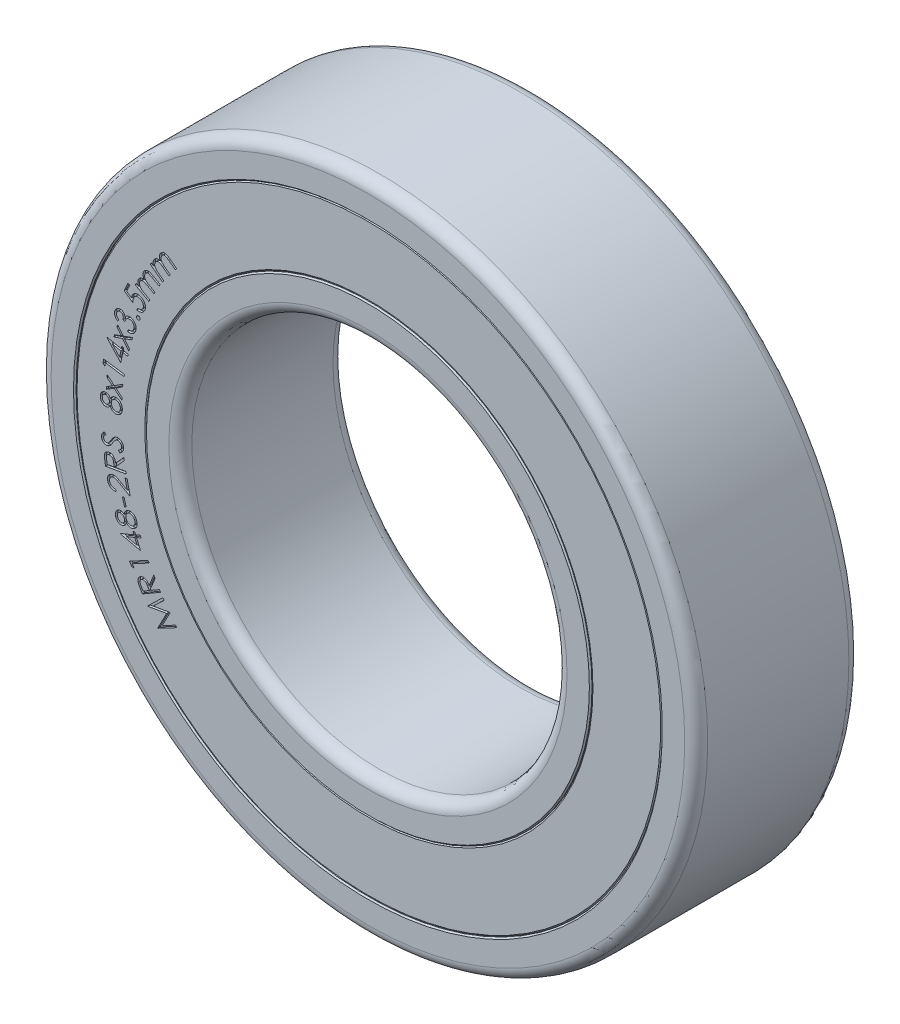
from build123d import *

# Parameters (mm, degrees)
SKETCH_R_INNER_BODY_W          = 3.5
SKETCH_R_INNER_BODY_H          = 0.75
FILLET_INNER_BODY_R            = 0.245
CHAMFER_INNER_BODY_SIZE        = 0.028
SKETCH_R_OUTER_BODY_W          = 3.5
SKETCH_R_OUTER_BODY_H          = 0.75
FILLET_OUTER_BODY_R            = 0.245
CHAMFER_OUTER_BODY_SIZE        = 0.028
SKETCH_R_SEAL_FACES_W          = 3.46
SKETCH_R_SEAL_FACES_H          = 1.5
CHAMFER_SEALS_SIZE             = 0.028
CUT_EXTRUDE_SEAL_LABEL_1_DEPTH = 0.05
CUT_EXTRUDE_SEAL_LABEL_2_DEPTH = 0.05


with BuildPart() as part:
    # Sketch R, INNER BODY → Revolve INNER BODY (revolve)
    with BuildSketch(Plane(origin=(0, 0, 0), x_dir=(0, 0, -1), z_dir=(1, 0, 0))):
        with Locations((0, 4.375)):
            Rectangle(SKETCH_R_INNER_BODY_W, SKETCH_R_INNER_BODY_H)
    revolve(axis=Axis((0, 0, 17.5), (0, 0, -1)))

    # Fillet INNER BODY
    fillet_inner_body_edges = [part.edges().sort_by_distance(p)[0] for p in [
        (0, -4, 1.75),
        (0, -4, -1.75),
    ]]
    fillet(fillet_inner_body_edges, radius=FILLET_INNER_BODY_R)

    # Chamfer INNER BODY
    chamfer_inner_body_edges = [part.edges().sort_by_distance(p)[0] for p in [
        (0, -4.75, -1.75),
        (0, -4.75, 1.75),
    ]]
    chamfer(chamfer_inner_body_edges, length=CHAMFER_INNER_BODY_SIZE)


with BuildPart() as body_2:
    # Sketch R, OUTER BODY → Revolve OUTER BODY (revolve)
    with BuildSketch(Plane(origin=(0, 0, 0), x_dir=(0, 0, -1), z_dir=(1, 0, 0))):
        with Locations((0, 6.625)):
            Rectangle(SKETCH_R_OUTER_BODY_W, SKETCH_R_OUTER_BODY_H)
    revolve(axis=Axis((0, 0, 17.5), (0, 0, -1)))

    # Fillet OUTER BODY
    fillet_outer_body_edges = [body_2.edges().sort_by_distance(p)[0] for p in [
        (0, -7, -1.75),
        (0, -7, 1.75),
    ]]
    fillet(fillet_outer_body_edges, radius=FILLET_OUTER_BODY_R)

    # Chamfer OUTER BODY
    chamfer_outer_body_edges = [body_2.edges().sort_by_distance(p)[0] for p in [
        (0, -6.25, 1.75),
        (0, -6.25, -1.75),
    ]]
    chamfer(chamfer_outer_body_edges, length=CHAMFER_OUTER_BODY_SIZE)


with BuildPart() as body_3:
    # Sketch R, SEAL FACES → Revolve SEALS (revolve)
    with BuildSketch(Plane(origin=(0, 0, 0), x_dir=(0, 0, -1), z_dir=(1, 0, 0))):
        with Locations((0, 5.5)):
            Rectangle(SKETCH_R_SEAL_FACES_W, SKETCH_R_SEAL_FACES_H)
    revolve(axis=Axis((0, 0, 17.5), (0, 0, -1)))

    # Chamfer SEALS
    chamfer_seals_edges = [body_3.edges().sort_by_distance(p)[0] for p in [
        (0, -4.75, -1.73),
        (0, -6.25, -1.73),
        (0, -6.25, 1.73),
        (0, -4.75, 1.73),
    ]]
    chamfer(chamfer_seals_edges, length=CHAMFER_SEALS_SIZE)

    # Sketch TEXT RADIUS 1 — MANUALLY ASSIGN TEXT AND FONT SIZE (FROM EQUATIONS) → Cut-Extrude SEAL LABEL 1 (cut)
    # profile 1 of 19: a face of its own
    with BuildSketch(Plane.XY.offset(1.73)):
        with BuildLine():
            Line((-4.662089173, 3.109968155), (-4.636758644, 3.144042674))
            Line((-4.636758644, 3.144042674), (-4.590694942, 3.109787866))
            add(Edge.make_bspline(
                [(-4.590694942, 3.109787866), (-4.592517911, 3.115709547), (-4.596010098, 3.127053473), (-4.59929289, 3.143837846), (-4.601191417, 3.159449674), (-4.600737474, 3.169459927), (-4.600520664, 3.174240991)],
                knots=[0, 0, 0, 0, 1.132612629, 2.169700619, 3.125818479, 4, 4, 4, 4], degree=3))
            add(Edge.make_bspline(
                [(-4.600520664, 3.174240991), (-4.599697327, 3.180375113), (-4.598079873, 3.19242566), (-4.592784987, 3.209730638), (-4.585466312, 3.225980349), (-4.578796582, 3.235717094), (-4.575460567, 3.240587145)],
                knots=[0, 0, 0, 0, 1.033329128, 2.029985862, 3.014653357, 4, 4, 4, 4], degree=3))
            add(Edge.make_bspline(
                [(-4.575460567, 3.240587145), (-4.573001104, 3.243708569), (-4.56810674, 3.249920243), (-4.559657662, 3.258188217), (-4.55051195, 3.265578461), (-4.54063536, 3.271805624), (-4.530402644, 3.277017332), (-4.520045926, 3.281147976), (-4.509594918, 3.283848236), (-4.498949679, 3.285392526), (-4.487721147, 3.285368248), (-4.475565584, 3.284219004), (-4.462388102, 3.281386856), (-4.453358308, 3.278748313), (-4.448627635, 3.277365991)],
                knots=[0, 0, 0, 0, 1.004294995, 1.998560229, 2.982576085, 3.973553232, 4.945697743, 5.884283805, 6.78758671, 7.670057284, 8.597343061, 9.620584656, 10.753433882, 12, 12, 12, 12], degree=3))
            add(Edge.make_bspline(
                [(-4.448627635, 3.277365991), (-4.451479234, 3.284003059), (-4.457021459, 3.296902532), (-4.462196657, 3.316855619), (-4.464947142, 3.336406601), (-4.464863396, 3.355562708), (-4.462133099, 3.374026029), (-4.457062996, 3.391601215), (-4.449605105, 3.40821833), (-4.442774376, 3.418203195), (-4.439342779, 3.423219357)],
                knots=[0, 0, 0, 0, 1.126764443, 2.189922799, 3.20801503, 4.202902978, 5.170533764, 6.113602877, 7.052318477, 8, 8, 8, 8], degree=3))
            add(Edge.make_bspline(
                [(-4.439342779, 3.423219357), (-4.435829392, 3.427599039), (-4.428967598, 3.436152743), (-4.416754722, 3.446886833), (-4.403496131, 3.45560407), (-4.389090216, 3.461947044), (-4.374023401, 3.46627469), (-4.358408091, 3.468050046), (-4.342457906, 3.467500764), (-4.328962482, 3.464969422), (-4.317808488, 3.461645922), (-4.308804797, 3.45820054), (-4.299294409, 3.453801139), (-4.289216443, 3.448570908), (-4.278553539, 3.442429548), (-4.267445461, 3.435288181), (-4.255753111, 3.427320547), (-4.247890537, 3.421589214), (-4.243819942, 3.418622001)],
                knots=[0, 0, 0, 0, 1.208935074, 2.361100966, 3.489849253, 4.618244064, 5.742463211, 6.85811479, 7.992799797, 9.172286031, 9.807865258, 10.501085257, 11.249221928, 12.066537832, 12.949070322, 13.901822324, 14.91373617, 16, 16, 16, 16], degree=3))
            Line((-4.243819942, 3.418622001), (-4.09823701, 3.310088347))
            Line((-4.09823701, 3.310088347), (-4.124378837, 3.275022241))
            Line((-4.124378837, 3.275022241), (-4.269961769, 3.383555895))
            add(Edge.make_bspline(
                [(-4.269961769, 3.383555895), (-4.273403066, 3.386099843), (-4.280021693, 3.390992603), (-4.289742033, 3.397693893), (-4.298681697, 3.403716744), (-4.306977567, 3.40886324), (-4.314573125, 3.413190904), (-4.321506326, 3.416654192), (-4.327682504, 3.419393908), (-4.334983654, 3.421947687), (-4.343758531, 3.423632523), (-4.354246681, 3.424145363), (-4.36475683, 3.422852297), (-4.375163633, 3.419817972), (-4.385272991, 3.415262732), (-4.39473409, 3.408928451), (-4.403510252, 3.400993215), (-4.408537783, 3.394720087), (-4.411127635, 3.391488587)],
                knots=[0, 0, 0, 0, 1.261398538, 2.426040887, 3.479925968, 4.438535432, 5.303167431, 6.05578827, 6.722217778, 7.293642043, 8.332418626, 9.343136184, 10.378053803, 11.437766522, 12.527806132, 13.633282723, 14.780823993, 16, 16, 16, 16], degree=3))
            add(Edge.make_bspline(
                [(-4.411127635, 3.391488587), (-4.414008674, 3.387245302), (-4.419692391, 3.378874144), (-4.425641396, 3.364871271), (-4.429514931, 3.350148848), (-4.430872543, 3.334745643), (-4.4300688, 3.319241084), (-4.427093173, 3.303938219), (-4.421686651, 3.289161817), (-4.415300235, 3.277244629), (-4.408784419, 3.26771046), (-4.402441084, 3.260145426), (-4.394975138, 3.252027974), (-4.38615927, 3.243523283), (-4.376290117, 3.234347114), (-4.364933842, 3.224983354), (-4.35253257, 3.214916459), (-4.343691975, 3.208257087), (-4.339102394, 3.204799885)],
                knots=[0, 0, 0, 0, 1.083736528, 2.137996514, 3.202724099, 4.295387462, 5.397511449, 6.48051944, 7.583377687, 8.716198803, 9.333842674, 10.025436448, 10.804340184, 11.668128347, 12.618207144, 13.656801752, 14.783532388, 16, 16, 16, 16], degree=3))
            Line((-4.339102394, 3.204799885), (-4.234715375, 3.127005414))
            Line((-4.234715375, 3.127005414), (-4.260136048, 3.092930895))
            Line((-4.260136048, 3.092930895), (-4.396614414, 3.194613587))
            add(Edge.make_bspline(
                [(-4.396614414, 3.194613587), (-4.400477994, 3.197485303), (-4.407907692, 3.203007635), (-4.418755285, 3.210648661), (-4.428822835, 3.217288538), (-4.43787946, 3.223270079), (-4.446295214, 3.228053269), (-4.453731322, 3.23220849), (-4.460427777, 3.235295613), (-4.468144618, 3.238186347), (-4.477347663, 3.240295933), (-4.488297964, 3.241179275), (-4.499251043, 3.24011584), (-4.510053856, 3.237429759), (-4.520492304, 3.233003556), (-4.530189073, 3.226774963), (-4.539196644, 3.218957455), (-4.544216688, 3.212641013), (-4.546794702, 3.209397241)],
                knots=[0, 0, 0, 0, 1.333772144, 2.56485482, 3.675501565, 4.675445181, 5.570759163, 6.356788694, 7.034781064, 7.611638375, 8.637516208, 9.639364183, 10.642594876, 11.672383912, 12.713086077, 13.768568536, 14.85406149, 16, 16, 16, 16], degree=3))
            add(Edge.make_bspline(
                [(-4.546794702, 3.209397241), (-4.549548521, 3.205361296), (-4.555038433, 3.197315386), (-4.560790384, 3.18377042), (-4.564393834, 3.169317412), (-4.565982809, 3.15418001), (-4.565524805, 3.138737556), (-4.562522698, 3.123551165), (-4.557533962, 3.108742261), (-4.551443294, 3.096810471), (-4.545079166, 3.08741016), (-4.539297425, 3.079946145), (-4.532539755, 3.072166554), (-4.524571453, 3.064248084), (-4.515733669, 3.05588254), (-4.505758296, 3.047342434), (-4.494819784, 3.038470495), (-4.487076758, 3.032601842), (-4.483062731, 3.029559501)],
                knots=[0, 0, 0, 0, 1.086667521, 2.166339834, 3.257659612, 4.395657553, 5.548043139, 6.686592511, 7.832129805, 9.020995616, 9.657981165, 10.359768168, 11.123828161, 11.952410041, 12.861911658, 13.835115128, 14.877711921, 16, 16, 16, 16], degree=3))
            Line((-4.483062731, 3.029559501), (-4.37011201, 2.945364789))
            Line((-4.37011201, 2.945364789), (-4.395442539, 2.91129027))
            Line((-4.395442539, 2.91129027), (-4.662089173, 3.109968155))
        make_face()
    # profile 2 of 19: a face of its own
    with BuildSketch(Plane.XY.offset(1.73)):
        with BuildLine():
            Line((-4.978982757, 2.569785336), (-4.958339728, 2.606654326))
            Line((-4.958339728, 2.606654326), (-4.908580113, 2.578799759))
            add(Edge.make_bspline(
                [(-4.908580113, 2.578799759), (-4.911158272, 2.584373573), (-4.916108172, 2.595074937), (-4.92140998, 2.611182315), (-4.925323212, 2.626285208), (-4.92619241, 2.636171354), (-4.926608959, 2.640909134)],
                knots=[0, 0, 0, 0, 1.131582089, 2.172564517, 3.124230431, 4, 4, 4, 4], degree=3))
            add(Edge.make_bspline(
                [(-4.926608959, 2.640909134), (-4.926605067, 2.647051992), (-4.926597406, 2.659142665), (-4.923548019, 2.67683521), (-4.918529089, 2.693786579), (-4.913223143, 2.704199019), (-4.910563286, 2.709418749)],
                knots=[0, 0, 0, 0, 1.033531076, 2.03424644, 3.014572699, 4, 4, 4, 4], degree=3))
            add(Edge.make_bspline(
                [(-4.910563286, 2.709418749), (-4.908519145, 2.712792637), (-4.904453002, 2.719503871), (-4.897345195, 2.728824068), (-4.889192607, 2.737175743), (-4.880339087, 2.74467612), (-4.870994244, 2.751247349), (-4.861230319, 2.756510737), (-4.851343908, 2.760621561), (-4.841041084, 2.763391187), (-4.830026797, 2.764929309), (-4.817941994, 2.765228086), (-4.80460493, 2.764303423), (-4.795408468, 2.762775061), (-4.790581315, 2.761972836)],
                knots=[0, 0, 0, 0, 1.005145687, 1.999405264, 2.979849851, 3.974315929, 4.953832589, 5.886058869, 6.796378814, 7.677086899, 8.597819994, 9.62464878, 10.753196011, 12, 12, 12, 12], degree=3))
            add(Edge.make_bspline(
                [(-4.790581315, 2.761972836), (-4.794236137, 2.768136831), (-4.801339191, 2.780116399), (-4.808940573, 2.799106496), (-4.814286666, 2.817942093), (-4.816601436, 2.836815083), (-4.816329482, 2.855343408), (-4.813646979, 2.873312007), (-4.808435521, 2.890650139), (-4.802979399, 2.901347551), (-4.800226747, 2.90674447)],
                knots=[0, 0, 0, 0, 1.125769747, 2.187905057, 3.207361414, 4.19821957, 5.16734909, 6.113968288, 7.048483813, 8, 8, 8, 8], degree=3))
            add(Edge.make_bspline(
                [(-4.800226747, 2.90674447), (-4.797356917, 2.911496371), (-4.791729653, 2.920814063), (-4.781122128, 2.932963198), (-4.769177129, 2.943231878), (-4.75586903, 2.951434402), (-4.741544958, 2.957595544), (-4.726390867, 2.961439001), (-4.71061789, 2.962808689), (-4.697016751, 2.962196049), (-4.685659163, 2.960230601), (-4.676330982, 2.958095029), (-4.666401332, 2.954938971), (-4.655800103, 2.951095102), (-4.644579667, 2.94633564), (-4.632699938, 2.940844293), (-4.620162913, 2.934529703), (-4.61169077, 2.929878329), (-4.607318094, 2.927477643)],
                knots=[0, 0, 0, 0, 1.204444177, 2.361716066, 3.487104345, 4.615991592, 5.745162065, 6.863233603, 7.997677961, 9.174477001, 9.80996661, 10.500533265, 11.252318612, 12.072376974, 12.95036142, 13.899853736, 14.916064157, 16, 16, 16, 16], degree=3))
            Line((-4.607318094, 2.927477643), (-4.450016411, 2.839587018))
            Line((-4.450016411, 2.839587018), (-4.471110161, 2.801726441))
            Line((-4.471110161, 2.801726441), (-4.628411844, 2.889617066))
            add(Edge.make_bspline(
                [(-4.628411844, 2.889617066), (-4.632129964, 2.891674577), (-4.639258334, 2.89561923), (-4.649638853, 2.901068756), (-4.659291924, 2.905715428), (-4.668076363, 2.909832547), (-4.676119748, 2.913088726), (-4.683375954, 2.915618734), (-4.689814781, 2.917601864), (-4.697370557, 2.919002814), (-4.706217403, 2.919670137), (-4.716595811, 2.918623981), (-4.726775746, 2.915970598), (-4.736665658, 2.911744062), (-4.746018536, 2.905934688), (-4.754557924, 2.898571399), (-4.762138806, 2.889589827), (-4.766273548, 2.882768327), (-4.768405834, 2.87925048)],
                knots=[0, 0, 0, 0, 1.261647201, 2.418825997, 3.480148039, 4.442190224, 5.298671207, 6.054817962, 6.72390743, 7.296047396, 8.333363873, 9.346223801, 10.378348376, 11.445503545, 12.527324639, 13.634307726, 14.780012599, 16, 16, 16, 16], degree=3))
            add(Edge.make_bspline(
                [(-4.768405834, 2.87925048), (-4.770689751, 2.874715558), (-4.77521492, 2.865730431), (-4.779328489, 2.851204523), (-4.781170317, 2.836182772), (-4.780574067, 2.8208644), (-4.777807547, 2.805645448), (-4.772795958, 2.79101219), (-4.765655051, 2.777127606), (-4.757894358, 2.766196372), (-4.750093763, 2.757751288), (-4.742955437, 2.75100897), (-4.734530073, 2.743962025), (-4.724783068, 2.736735523), (-4.713803779, 2.729092383), (-4.701495095, 2.721252685), (-4.687920821, 2.712998379), (-4.678366291, 2.707561021), (-4.673393815, 2.704731249)],
                knots=[0, 0, 0, 0, 1.080406139, 2.140629606, 3.198896993, 4.294893561, 5.395466413, 6.485249809, 7.579579233, 8.713623598, 9.330207321, 10.027954485, 10.80543856, 11.670166868, 12.613675227, 13.656653698, 14.78044915, 16, 16, 16, 16], degree=3))
            Line((-4.673393815, 2.704731249), (-4.560623382, 2.641720432))
            Line((-4.560623382, 2.641720432), (-4.581176267, 2.604941586))
            Line((-4.581176267, 2.604941586), (-4.728652228, 2.687423557))
            add(Edge.make_bspline(
                [(-4.728652228, 2.687423557), (-4.732854495, 2.689715386), (-4.740903608, 2.694105206), (-4.752527092, 2.700276796), (-4.763231681, 2.705590452), (-4.77300754, 2.710113365), (-4.781817231, 2.713944215), (-4.789730231, 2.716920376), (-4.796696984, 2.719155383), (-4.804677801, 2.720958862), (-4.81399659, 2.721825627), (-4.824912351, 2.721398357), (-4.83553245, 2.718824665), (-4.845827633, 2.714802417), (-4.855508893, 2.709120309), (-4.864269731, 2.701757425), (-4.872129157, 2.692892294), (-4.876264724, 2.685995975), (-4.878381795, 2.682465624)],
                knots=[0, 0, 0, 0, 1.336171973, 2.559332533, 3.673433841, 4.67169399, 5.566013711, 6.354337968, 7.030848288, 7.60674628, 8.635002555, 9.634424926, 10.641596096, 11.669612864, 12.711126105, 13.759305639, 14.852947778, 16, 16, 16, 16], degree=3))
            add(Edge.make_bspline(
                [(-4.878381795, 2.682465624), (-4.880572298, 2.678139966), (-4.88494111, 2.669512729), (-4.888871106, 2.655429624), (-4.890533901, 2.640747239), (-4.890199607, 2.625657122), (-4.887605066, 2.610581793), (-4.882740758, 2.595996919), (-4.875825332, 2.582083391), (-4.868284752, 2.571113935), (-4.860867499, 2.562643445), (-4.854183786, 2.556106026), (-4.846459872, 2.549378709), (-4.837620962, 2.542631545), (-4.827847353, 2.535514732), (-4.816960576, 2.528374245), (-4.805022644, 2.521044547), (-4.796635629, 2.516274832), (-4.792294055, 2.513805768)],
                knots=[0, 0, 0, 0, 1.086550873, 2.167053171, 3.260743281, 4.394441398, 5.544580167, 6.681665487, 7.834176086, 9.02246207, 9.658369347, 10.35962676, 11.119925091, 11.956573996, 12.85532583, 13.833910183, 14.878714457, 16, 16, 16, 16], degree=3))
            Line((-4.792294055, 2.513805768), (-4.670238767, 2.445566586))
            Line((-4.670238767, 2.445566586), (-4.690881795, 2.408697595))
            Line((-4.690881795, 2.408697595), (-4.978982757, 2.569785336))
        make_face()
    # profile 3 of 19: a face of its own
    with BuildSketch(Plane.XY.offset(1.73)):
        with BuildLine():
            Line((-5.135036748, 2.521565965), (-5.096364873, 2.503537119))
            Line((-5.096364873, 2.503537119), (-5.163882901, 2.358855628))
            Line((-5.163882901, 2.358855628), (-5.062560786, 2.287190965))
            add(Edge.make_bspline(
                [(-5.062560786, 2.287190965), (-5.061712123, 2.292039268), (-5.060074162, 2.301396738), (-5.056838923, 2.314814413), (-5.05293009, 2.327129656), (-5.049639988, 2.334780157), (-5.048047565, 2.338483032)],
                knots=[0, 0, 0, 0, 1.104499449, 2.131739665, 3.09575393, 4, 4, 4, 4], degree=3))
            add(Edge.make_bspline(
                [(-5.048047565, 2.338483032), (-5.045818588, 2.342976857), (-5.041462298, 2.351759546), (-5.033598777, 2.363933775), (-5.024923863, 2.374994174), (-5.015384739, 2.384944638), (-5.004895364, 2.393667535), (-4.993589595, 2.401287702), (-4.981342477, 2.407712933), (-4.968334251, 2.412868914), (-4.954859227, 2.416877377), (-4.941104751, 2.419360088), (-4.92721705, 2.420621244), (-4.913204339, 2.420163268), (-4.899053694, 2.41851834), (-4.884849587, 2.415135824), (-4.870449325, 2.410615489), (-4.861083084, 2.406483699), (-4.856310786, 2.404378465)],
                knots=[0, 0, 0, 0, 1.058700304, 2.069113806, 3.054261963, 4.023669152, 4.974304877, 5.930010469, 6.897962622, 7.888999977, 8.880991786, 9.861797356, 10.836218075, 11.820159606, 12.817435058, 13.839597373, 14.899229188, 16, 16, 16, 16], degree=3))
            add(Edge.make_bspline(
                [(-4.856310786, 2.404378465), (-4.849876535, 2.401114409), (-4.837151709, 2.394659183), (-4.81987945, 2.382249223), (-4.804499656, 2.367982372), (-4.793347197, 2.354589761), (-4.785604878, 2.343133589), (-4.780400837, 2.334323393), (-4.775938879, 2.325324067), (-4.771986888, 2.316179122), (-4.768840645, 2.306797028), (-4.766441462, 2.297233045), (-4.76457279, 2.287518802), (-4.763559326, 2.277628511), (-4.76303207, 2.267632094), (-4.763464374, 2.257571734), (-4.764448842, 2.24748938), (-4.766049475, 2.237293983), (-4.76851527, 2.227104463), (-4.771595297, 2.216835872), (-4.775375154, 2.206532921), (-4.778414759, 2.199763749), (-4.779958623, 2.19632558)],
                knots=[0, 0, 0, 0, 1.740833767, 3.442795173, 5.117182077, 6.797505818, 7.639046237, 8.455707084, 9.267255054, 10.064061268, 10.860569865, 11.654560793, 12.444693499, 13.247888228, 14.054421569, 14.860660884, 15.67754751, 16.500954815, 17.351339373, 18.207897404, 19.089762935, 20, 20, 20, 20], degree=3))
            add(Edge.make_bspline(
                [(-4.779958623, 2.19632558), (-4.781936707, 2.192323915), (-4.785811255, 2.184485705), (-4.792662261, 2.173476727), (-4.80019717, 2.163370061), (-4.808553216, 2.154217126), (-4.817563238, 2.145989588), (-4.827333988, 2.138716643), (-4.837772344, 2.132283248), (-4.848929886, 2.126966162), (-4.860442299, 2.122469595), (-4.872282699, 2.119319773), (-4.884194768, 2.116933289), (-4.896317132, 2.116049386), (-4.908592074, 2.115973558), (-4.921043894, 2.117213301), (-4.933656571, 2.119435256), (-4.941964738, 2.121764909), (-4.946184584, 2.122948176)],
                knots=[0, 0, 0, 0, 1.073863033, 2.103415091, 3.115908787, 4.103957346, 5.081789393, 6.047998746, 7.031590638, 8.027836724, 9.019056348, 10.001584151, 10.973191664, 11.938344857, 12.921910162, 13.924358231, 14.945749637, 16, 16, 16, 16], degree=3))
            Line((-4.946184584, 2.122948176), (-4.92671343, 2.164684955))
            add(Edge.make_bspline(
                [(-4.92671343, 2.164684955), (-4.922580736, 2.163793495), (-4.91460831, 2.162073768), (-4.902824195, 2.160878025), (-4.89174116, 2.160997879), (-4.881289137, 2.162561498), (-4.87133366, 2.165406251), (-4.861724113, 2.169475781), (-4.852458586, 2.174913417), (-4.843513466, 2.18139284), (-4.835292918, 2.189025811), (-4.827957644, 2.197457249), (-4.821535763, 2.206568102), (-4.818219331, 2.213196051), (-4.81655718, 2.216517888)],
                knots=[0, 0, 0, 0, 1.14507997, 2.208986744, 3.202600774, 4.141200265, 5.064017862, 6.001769157, 6.961329911, 7.969552555, 8.989545496, 9.993847067, 10.994543585, 12, 12, 12, 12], degree=3))
            add(Edge.make_bspline(
                [(-4.81655718, 2.216517888), (-4.815094166, 2.219823148), (-4.812197775, 2.22636671), (-4.80931107, 2.236596476), (-4.807325879, 2.246877389), (-4.806649048, 2.257255958), (-4.807009656, 2.267704731), (-4.808459687, 2.278253804), (-4.811107085, 2.288870345), (-4.814793624, 2.299458302), (-4.819439372, 2.309762027), (-4.825017468, 2.319542064), (-4.831584434, 2.328572898), (-4.838881713, 2.337058035), (-4.847230426, 2.344686439), (-4.856421174, 2.351700044), (-4.866520716, 2.35800457), (-4.873737686, 2.361617368), (-4.877404536, 2.363452984)],
                knots=[0, 0, 0, 0, 0.978486588, 1.937151159, 2.873133829, 3.811911064, 4.748991329, 5.702592556, 6.692132033, 7.709430255, 8.737235087, 9.75136664, 10.754848432, 11.759189001, 12.779221551, 13.813490729, 14.889062605, 16, 16, 16, 16], degree=3))
            add(Edge.make_bspline(
                [(-4.877404536, 2.363452984), (-4.880805028, 2.364958219), (-4.8874397, 2.36789507), (-4.897616091, 2.371157088), (-4.907673697, 2.373332075), (-4.917634837, 2.374516837), (-4.927513824, 2.374727294), (-4.93731193, 2.373819229), (-4.946969463, 2.37180371), (-4.956438663, 2.368853257), (-4.965544856, 2.364856546), (-4.974219453, 2.360019113), (-4.982298121, 2.354181987), (-4.989839965, 2.347438617), (-4.996872429, 2.339788601), (-5.003268361, 2.33114185), (-5.009176136, 2.321655513), (-5.012528891, 2.314836724), (-5.014243478, 2.311349619)],
                knots=[0, 0, 0, 0, 1.081298804, 2.109712974, 3.102473172, 4.070761262, 5.023775964, 5.97192698, 6.926864214, 7.889016446, 8.852081631, 9.814948421, 10.773240807, 11.745309749, 12.753802358, 13.790579261, 14.87010979, 16, 16, 16, 16], degree=3))
            add(Edge.make_bspline(
                [(-5.014243478, 2.311349619), (-5.015609003, 2.308242131), (-5.018420055, 2.301845095), (-5.021898099, 2.291653979), (-5.024824296, 2.280671365), (-5.027495889, 2.268961437), (-5.029476186, 2.256391478), (-5.03124631, 2.243055455), (-5.032378123, 2.228912947), (-5.032785141, 2.219223793), (-5.032993478, 2.214264282)],
                knots=[0, 0, 0, 0, 0.818357624, 1.684661176, 2.59356586, 3.558823013, 4.579842983, 5.661190607, 6.802852146, 8, 8, 8, 8], degree=3))
            Line((-5.032993478, 2.214264282), (-5.217067998, 2.345694571))
            Line((-5.217067998, 2.345694571), (-5.135036748, 2.521565965))
        make_face()
    # profile 4 of 19: a face of its own
    with BuildSketch(Plane.XY.offset(1.73)):
        with BuildLine():
            add(Edge.make_bspline(
                [(-4.950835835, 2.00539545), (-4.949826688, 2.007680196), (-4.947846027, 2.012164486), (-4.943143597, 2.017773344), (-4.937630675, 2.02255369), (-4.931085953, 2.026043681), (-4.924020345, 2.028452662), (-4.916684207, 2.029235519), (-4.909265689, 2.028665837), (-4.90456688, 2.02704812), (-4.90215795, 2.026218768)],
                knots=[0, 0, 0, 0, 1.013856182, 1.989904269, 2.954889114, 3.974947212, 4.994121633, 5.980652409, 6.964744669, 8, 8, 8, 8], degree=3))
            add(Edge.make_bspline(
                [(-4.90215795, 2.026218768), (-4.899878939, 2.025202812), (-4.895384396, 2.023199198), (-4.889661969, 2.018556297), (-4.884937068, 2.012926725), (-4.881428854, 2.006366549), (-4.878952748, 1.999379688), (-4.878013845, 1.992103446), (-4.878626077, 1.984806141), (-4.880185086, 1.980161724), (-4.880974056, 1.977811316)],
                knots=[0, 0, 0, 0, 1.017289906, 2.006245029, 2.983899194, 4.007412021, 5.033948526, 6.000873438, 6.988298618, 8, 8, 8, 8], degree=3))
            add(Edge.make_bspline(
                [(-4.880974056, 1.977811316), (-4.882025788, 1.975535199), (-4.884094404, 1.971058386), (-4.888722008, 1.965312434), (-4.894376559, 1.960575349), (-4.900953487, 1.957063299), (-4.908049129, 1.95479051), (-4.915333661, 1.953960132), (-4.922657052, 1.954543496), (-4.927301511, 1.95610674), (-4.92965194, 1.956897854)],
                knots=[0, 0, 0, 0, 1.020373495, 2.006936208, 2.982225302, 4.014036018, 5.03042049, 6.005709583, 6.990746054, 8, 8, 8, 8], degree=3))
            add(Edge.make_bspline(
                [(-4.92965194, 1.956897854), (-4.931989784, 1.957945066), (-4.936523547, 1.959975917), (-4.942353888, 1.964581412), (-4.947143134, 1.97016492), (-4.950663449, 1.976735288), (-4.953056998, 1.983775836), (-4.953855213, 1.991048592), (-4.953281288, 1.998379901), (-4.951664926, 2.003016943), (-4.950835835, 2.00539545)],
                knots=[0, 0, 0, 0, 1.039886744, 2.016645155, 2.997611277, 4.016326331, 5.034158872, 6.007230229, 6.977835769, 8, 8, 8, 8], degree=3))
        make_face()
    # profile 5 of 19: a face of its own
    with BuildSketch(Plane.XY.offset(1.73)):
        with BuildLine():
            Line((-5.335406753, 1.754282589), (-5.349919974, 1.711193647))
            add(Edge.make_bspline(
                [(-5.349919974, 1.711193647), (-5.353839237, 1.713655106), (-5.3615012, 1.718467137), (-5.372046264, 1.726601514), (-5.381762399, 1.734945361), (-5.390450052, 1.743809405), (-5.398130655, 1.7531058), (-5.404843284, 1.762823069), (-5.410651372, 1.7728907), (-5.415321909, 1.783395026), (-5.419035614, 1.794133327), (-5.421717888, 1.805028716), (-5.42349903, 1.816002191), (-5.424054756, 1.827052184), (-5.42385367, 1.838186603), (-5.422442995, 1.849372168), (-5.420112153, 1.860656602), (-5.417802319, 1.868061744), (-5.416626705, 1.871830666)],
                knots=[0, 0, 0, 0, 1.172404062, 2.291991492, 3.371701311, 4.416518815, 5.433598574, 6.424419041, 7.406861879, 8.375031181, 9.333627231, 10.283072884, 11.215908696, 12.1465968, 13.083651365, 14.034928041, 14.999856701, 16, 16, 16, 16], degree=3))
            add(Edge.make_bspline(
                [(-5.416626705, 1.871830666), (-5.414630399, 1.877180416), (-5.410661203, 1.887817163), (-5.402337201, 1.902560036), (-5.392502826, 1.916220739), (-5.38102249, 1.928452278), (-5.368336292, 1.939150852), (-5.3546854, 1.947876066), (-5.340338004, 1.9547087), (-5.325283701, 1.959081688), (-5.310089333, 1.96171228), (-5.295076491, 1.962009023), (-5.280378276, 1.960515213), (-5.271042363, 1.957765934), (-5.266356272, 1.956385955)],
                knots=[0, 0, 0, 0, 1.073407265, 2.13422351, 3.17506909, 4.235523395, 5.283414214, 6.290693649, 7.277502614, 8.26348457, 9.232382034, 10.171553517, 11.082225066, 12, 12, 12, 12], degree=3))
            add(Edge.make_bspline(
                [(-5.266356272, 1.956385955), (-5.261975685, 1.954733664), (-5.253331852, 1.951473341), (-5.241469839, 1.944565971), (-5.231008347, 1.936113925), (-5.221614552, 1.926420932), (-5.213857799, 1.914976935), (-5.207079995, 1.902311956), (-5.20186535, 1.888051861), (-5.199455286, 1.877958804), (-5.198207234, 1.872732108)],
                knots=[0, 0, 0, 0, 0.989616869, 1.952725392, 2.889266152, 3.82934104, 4.797830158, 5.804845413, 6.863238034, 8, 8, 8, 8], degree=3))
            add(Edge.make_bspline(
                [(-5.198207234, 1.872732108), (-5.194374722, 1.876926618), (-5.186833587, 1.885180048), (-5.173859806, 1.89556205), (-5.159991907, 1.904227575), (-5.150015329, 1.908409516), (-5.145022138, 1.910502541)],
                knots=[0, 0, 0, 0, 1.03320455, 2.033010267, 3.015538639, 4, 4, 4, 4], degree=3))
            add(Edge.make_bspline(
                [(-5.145022138, 1.910502541), (-5.141466481, 1.911769949), (-5.134469349, 1.914264067), (-5.123741268, 1.91683594), (-5.113108787, 1.918604503), (-5.102485437, 1.919293097), (-5.091894019, 1.919155391), (-5.081345683, 1.917930675), (-5.070794606, 1.915912803), (-5.063934506, 1.913756151), (-5.060466849, 1.912666003)],
                knots=[0, 0, 0, 0, 1.048677955, 2.063680146, 3.062047512, 4.041647961, 5.019109231, 6.002442046, 6.990270404, 8, 8, 8, 8], degree=3))
            add(Edge.make_bspline(
                [(-5.060466849, 1.912666003), (-5.054626483, 1.91041785), (-5.042973287, 1.905932143), (-5.026681052, 1.896363295), (-5.0116714, 1.884549322), (-5.000295834, 1.873047779), (-4.992084358, 1.862904112), (-4.986412949, 1.854995425), (-4.981297333, 1.846835036), (-4.976899134, 1.838351801), (-4.973090201, 1.829590367), (-4.969957938, 1.820535021), (-4.967311583, 1.81124586), (-4.964692369, 1.79850795), (-4.962945577, 1.782186354), (-4.96345252, 1.76232618), (-4.966355463, 1.742178221), (-4.970356199, 1.72905982), (-4.972395936, 1.722371531)],
                knots=[0, 0, 0, 0, 1.284435751, 2.562815652, 3.86482542, 5.201004768, 5.877066241, 6.545384185, 7.199952405, 7.854549752, 8.507280317, 9.161528048, 9.822300295, 10.490817912, 11.832195451, 13.184910512, 14.564754016, 16, 16, 16, 16], degree=3))
            add(Edge.make_bspline(
                [(-4.972395936, 1.722371531), (-4.974007662, 1.717925607), (-4.977159402, 1.709231574), (-4.983013826, 1.696886113), (-4.989537332, 1.685407665), (-4.997014052, 1.674882265), (-5.005214993, 1.665197031), (-5.014235418, 1.656430417), (-5.024085786, 1.64863995), (-5.034586433, 1.641654371), (-5.045928448, 1.635833858), (-5.057864439, 1.630888606), (-5.070534037, 1.627206002), (-5.083857749, 1.624746186), (-5.097774899, 1.62315688), (-5.11236645, 1.622876614), (-5.127611622, 1.623560753), (-5.13793776, 1.62488124), (-5.143219253, 1.625556628)],
                knots=[0, 0, 0, 0, 1.050719384, 2.054688504, 3.033136246, 3.98199943, 4.920223473, 5.850783933, 6.772940075, 7.70849735, 8.649570258, 9.602187613, 10.576591552, 11.576129197, 12.611018434, 13.686747458, 14.816844564, 16, 16, 16, 16], degree=3))
            Line((-5.143219253, 1.625556628), (-5.129246897, 1.66693283))
            add(Edge.make_bspline(
                [(-5.129246897, 1.66693283), (-5.125612201, 1.666755405), (-5.118556001, 1.666410961), (-5.108263062, 1.666356967), (-5.098568952, 1.66700009), (-5.08948204, 1.668173617), (-5.080975892, 1.66976305), (-5.073081009, 1.671895012), (-5.065828627, 1.674709594), (-5.061321345, 1.676992874), (-5.059114686, 1.678110714)],
                knots=[0, 0, 0, 0, 1.213746613, 2.35630142, 3.430991755, 4.451605866, 5.410829626, 6.315348711, 7.17523416, 8, 8, 8, 8], degree=3))
            add(Edge.make_bspline(
                [(-5.059114686, 1.678110714), (-5.056492123, 1.679676231), (-5.051276023, 1.682789937), (-5.044132357, 1.688479449), (-5.03751642, 1.694809843), (-5.031480693, 1.701846697), (-5.026033905, 1.709583001), (-5.021174244, 1.718009229), (-5.016813039, 1.727095801), (-5.014497833, 1.733526834), (-5.013321416, 1.736794608)],
                knots=[0, 0, 0, 0, 0.961553838, 1.91246535, 2.870141657, 3.843788073, 4.828969251, 5.847267442, 6.906140752, 8, 8, 8, 8], degree=3))
            add(Edge.make_bspline(
                [(-5.013321416, 1.736794608), (-5.012149163, 1.740564113), (-5.009854665, 1.747942311), (-5.007503467, 1.759068107), (-5.006201775, 1.769931625), (-5.00604333, 1.780528749), (-5.006804896, 1.790836162), (-5.008738718, 1.80086757), (-5.011711997, 1.810635835), (-5.015773434, 1.820029497), (-5.020633321, 1.828891999), (-5.026022344, 1.837121895), (-5.031987724, 1.844591799), (-5.038638096, 1.851204403), (-5.045853261, 1.857117417), (-5.05376322, 1.862131001), (-5.062144478, 1.866544761), (-5.068100958, 1.868740519), (-5.071103868, 1.869847493)],
                knots=[0, 0, 0, 0, 1.169728307, 2.289554575, 3.365698424, 4.408022345, 5.426631235, 6.424146348, 7.430057402, 8.447614191, 9.452104465, 10.423016531, 11.360628798, 12.280212485, 13.198371431, 14.119980492, 15.052203773, 16, 16, 16, 16], degree=3))
            add(Edge.make_bspline(
                [(-5.071103868, 1.869847493), (-5.075221933, 1.871061275), (-5.083405594, 1.873473375), (-5.096231394, 1.87474902), (-5.109218996, 1.874202826), (-5.122199386, 1.871757088), (-5.134782406, 1.867590708), (-5.14676474, 1.861971179), (-5.157598532, 1.854310749), (-5.16596912, 1.846798389), (-5.172220697, 1.839674339), (-5.176951274, 1.83340858), (-5.181622775, 1.826193051), (-5.186458669, 1.818194955), (-5.191037558, 1.809140304), (-5.195865684, 1.799320343), (-5.200631611, 1.78857945), (-5.203668355, 1.781064684), (-5.205238484, 1.777179224)],
                knots=[0, 0, 0, 0, 1.124314376, 2.23430392, 3.362618692, 4.525356653, 5.687078633, 6.833019053, 7.983262905, 9.155211132, 9.775197502, 10.467365175, 11.212959274, 12.029564492, 12.918115844, 13.873599335, 14.900558585, 16, 16, 16, 16], degree=3))
            Line((-5.205238484, 1.777179224), (-5.244090647, 1.790340281))
            add(Edge.make_bspline(
                [(-5.244090647, 1.790340281), (-5.242616805, 1.795123957), (-5.239727909, 1.804500494), (-5.237021565, 1.818755213), (-5.235794087, 1.83277752), (-5.236233518, 1.84639335), (-5.237688583, 1.85924289), (-5.240716791, 1.870883188), (-5.244756677, 1.881255301), (-5.250393915, 1.890074123), (-5.256912249, 1.897623777), (-5.264293845, 1.903920874), (-5.272506935, 1.908992577), (-5.27848333, 1.911313832), (-5.281500503, 1.912485714)],
                knots=[0, 0, 0, 0, 1.266729052, 2.482930197, 3.66644118, 4.823385264, 5.927584998, 6.93336314, 7.861672809, 8.733540969, 9.569579041, 10.379196807, 11.181740091, 12, 12, 12, 12], degree=3))
            add(Edge.make_bspline(
                [(-5.281500503, 1.912485714), (-5.283769713, 1.913205058), (-5.288278579, 1.914634377), (-5.295225834, 1.915731353), (-5.302168192, 1.916235714), (-5.309102466, 1.915872512), (-5.31603832, 1.914643976), (-5.322958698, 1.912769557), (-5.329899372, 1.910103681), (-5.336721472, 1.90673024), (-5.343325012, 1.902686746), (-5.349445861, 1.897961187), (-5.355154114, 1.89277342), (-5.360247422, 1.886903412), (-5.364831768, 1.880486369), (-5.368988864, 1.873536515), (-5.372647603, 1.866007009), (-5.374549451, 1.860673083), (-5.375520936, 1.857948455)],
                knots=[0, 0, 0, 0, 0.943243761, 1.87420261, 2.782207542, 3.701413232, 4.620618922, 5.572113878, 6.541880745, 7.565548189, 8.587895802, 9.608434565, 10.629321432, 11.643153405, 12.685327541, 13.754628113, 14.853039537, 16, 16, 16, 16], degree=3))
            add(Edge.make_bspline(
                [(-5.375520936, 1.857948455), (-5.376849058, 1.85347431), (-5.379442559, 1.844737391), (-5.38063041, 1.83130483), (-5.379792799, 1.818161812), (-5.377053418, 1.807517529), (-5.373666518, 1.799197607), (-5.370407678, 1.792843439), (-5.366314666, 1.786508802), (-5.361636724, 1.780030188), (-5.35605936, 1.77369561), (-5.349956778, 1.767136548), (-5.342966374, 1.760676391), (-5.337977301, 1.756456716), (-5.335406753, 1.754282589)],
                knots=[0, 0, 0, 0, 1.401675288, 2.737132324, 4.033556798, 5.349642265, 6.023088068, 6.734969359, 7.49518831, 8.29109579, 9.137647516, 10.033305298, 10.98668858, 12, 12, 12, 12], degree=3))
        make_face()
    # profile 6 of 19: a face of its own
    with BuildSketch(Plane.XY.offset(1.73)):
        Polygon((-5.433772716, 1.379254917), (-5.419710216, 1.428473667), (-5.277372475, 1.478954436), (-5.371302764, 1.597223667), (-5.357240264, 1.646442417), (-5.23698786, 1.494008522), (-5.034523918, 1.568828234), (-5.048766706, 1.518978474), (-5.2105756, 1.459843859), (-5.104295552, 1.325348667), (-5.118358052, 1.276400349), (-5.25105036, 1.445060205), align=None)
    # profile 7 of 19: a face of its own
    with BuildSketch(Plane.XY.offset(1.73)):
        Polygon((-5.586411646, 1.294440343), (-5.584518617, 1.303364622), (-5.278478953, 1.239362218), (-5.267391213, 1.292547314), (-5.225293857, 1.283803324), (-5.236381597, 1.230618228), (-5.134248184, 1.209254045), (-5.143442896, 1.165353805), (-5.245576309, 1.186717988), (-5.289476549, 0.976772074), align=None)
        Polygon((-5.287673665, 1.195461978), (-5.470756597, 1.233773276), (-5.314716934, 1.066195151), align=None, mode=Mode.SUBTRACT)
    # profile 8 of 19: a face of its own
    with BuildSketch(Plane.XY.offset(1.73)):
        Polygon((-5.668158679, 0.775568746), (-5.655718775, 0.862738218), (-5.212299304, 0.799637256), (-5.2186094, 0.755556727), (-5.618579352, 0.812527881), (-5.628405073, 0.742936535), align=None)
    # profile 9 of 19: a face of its own
    with BuildSketch(Plane.XY.offset(1.73)):
        Polygon((-5.596872466, 0.331716821), (-5.593356841, 0.3828286), (-5.464811168, 0.462155523), (-5.581367658, 0.558068985), (-5.577942178, 0.609180764), (-5.428302754, 0.48532259), (-5.245940976, 0.600977639), (-5.249456601, 0.54923485), (-5.39540011, 0.457377879), (-5.263158524, 0.348123071), (-5.266674149, 0.297281725), (-5.431818379, 0.434481244), align=None)
    # profile 10 of 19: a face of its own
    with BuildSketch(Plane.XY.offset(1.73)):
        with BuildLine():
            add(Edge.make_bspline(
                [(-5.510706935, 0.20334532), (-5.508711993, 0.206950108), (-5.504823616, 0.213976265), (-5.498323303, 0.223779622), (-5.491881958, 0.232922645), (-5.485243735, 0.241246269), (-5.478315992, 0.248622753), (-5.471439868, 0.255406428), (-5.464154481, 0.261119872), (-5.45683283, 0.266271057), (-5.449220839, 0.270566549), (-5.441434582, 0.274310389), (-5.433406812, 0.27736104), (-5.425181581, 0.279805011), (-5.416744092, 0.281622589), (-5.408064498, 0.282780524), (-5.399145019, 0.283346762), (-5.39312924, 0.283198015), (-5.390093954, 0.283122965)],
                knots=[0, 0, 0, 0, 1.287559035, 2.509604591, 3.674830952, 4.783987731, 5.83429545, 6.837545513, 7.799985065, 8.725067103, 9.633932304, 10.52895226, 11.423972215, 12.315682851, 13.209321297, 14.119399451, 15.051135474, 16, 16, 16, 16], degree=3))
            add(Edge.make_bspline(
                [(-5.390093954, 0.283122965), (-5.385848921, 0.28287275), (-5.377463826, 0.282378507), (-5.365123639, 0.280243034), (-5.353214287, 0.277088699), (-5.341719207, 0.272928472), (-5.330636119, 0.267758404), (-5.319982189, 0.261517777), (-5.309751729, 0.254211394), (-5.303418696, 0.248624799), (-5.300220156, 0.245803253)],
                knots=[0, 0, 0, 0, 1.025538112, 2.025716408, 3.015961885, 3.995422612, 4.971872419, 5.96307322, 6.971236837, 8, 8, 8, 8], degree=3))
            add(Edge.make_bspline(
                [(-5.300220156, 0.245803253), (-5.296486234, 0.242105399), (-5.289058801, 0.234749712), (-5.27969527, 0.22218696), (-5.271861659, 0.208631898), (-5.265622384, 0.19400745), (-5.260954575, 0.178337248), (-5.25779554, 0.161639042), (-5.256262325, 0.143878422), (-5.256478997, 0.131712804), (-5.256590348, 0.125460705)],
                knots=[0, 0, 0, 0, 0.952401963, 1.894496021, 2.832432029, 3.787405255, 4.772272885, 5.793413018, 6.866000931, 8, 8, 8, 8], degree=3))
            add(Edge.make_bspline(
                [(-5.256590348, 0.125460705), (-5.256934584, 0.119470617), (-5.257605507, 0.107795804), (-5.26035479, 0.090937859), (-5.264282561, 0.075231287), (-5.269545197, 0.060707363), (-5.275981206, 0.047275126), (-5.283915699, 0.035115972), (-5.293057457, 0.02410166), (-5.303457086, 0.014465812), (-5.314480292, 0.005954358), (-5.32587588, -0.00136201), (-5.337467031, -0.007550813), (-5.349283028, -0.01254405), (-5.361343619, -0.016238541), (-5.373586602, -0.018807442), (-5.386099408, -0.020096478), (-5.394508668, -0.019993733), (-5.3987478, -0.019941939)],
                knots=[0, 0, 0, 0, 1.263885253, 2.46334019, 3.593868034, 4.671706233, 5.714054316, 6.725883443, 7.724083478, 8.723227342, 9.707507732, 10.656159228, 11.574104218, 12.473911361, 13.355343967, 14.228524284, 15.106994083, 16, 16, 16, 16], degree=3))
            add(Edge.make_bspline(
                [(-5.3987478, -0.019941939), (-5.401818039, -0.019786459), (-5.407924849, -0.019477203), (-5.416888763, -0.018052805), (-5.425633463, -0.016180585), (-5.434103132, -0.013652048), (-5.442338775, -0.01050241), (-5.450278654, -0.006650768), (-5.458072426, -0.002391839), (-5.465496634, 0.002719903), (-5.472634256, 0.008543318), (-5.479642568, 0.015033892), (-5.486309669, 0.022500212), (-5.492750323, 0.030773144), (-5.499032804, 0.039832242), (-5.504921397, 0.049792733), (-5.510735457, 0.060496525), (-5.51423401, 0.068048197), (-5.516025445, 0.071915032)],
                knots=[0, 0, 0, 0, 0.932868285, 1.855506655, 2.752152559, 3.647079103, 4.536687264, 5.426389004, 6.325028951, 7.231050049, 8.158727738, 9.120595813, 10.128408378, 11.194352307, 12.302908579, 13.473383176, 14.706245444, 16, 16, 16, 16], degree=3))
            add(Edge.make_bspline(
                [(-5.516025445, 0.071915032), (-5.519118513, 0.066812976), (-5.525092973, 0.056958026), (-5.535808905, 0.043944983), (-5.547338018, 0.032870519), (-5.559962852, 0.024114305), (-5.573145199, 0.017411871), (-5.586783818, 0.012715009), (-5.600837317, 0.010089625), (-5.61033602, 0.010080607), (-5.615093954, 0.01007609)],
                knots=[0, 0, 0, 0, 1.161996985, 2.244472049, 3.276412789, 4.269452638, 5.22841471, 6.151075819, 7.073867122, 8, 8, 8, 8], degree=3))
            add(Edge.make_bspline(
                [(-5.615093954, 0.01007609), (-5.619954593, 0.010501955), (-5.629687969, 0.011354746), (-5.644065425, 0.015303648), (-5.658109747, 0.02142716), (-5.671711375, 0.029608319), (-5.684509743, 0.039619313), (-5.695793978, 0.051512939), (-5.70556789, 0.064973858), (-5.713708355, 0.079836351), (-5.719976805, 0.095848916), (-5.724321102, 0.112577646), (-5.726781101, 0.129863544), (-5.726662278, 0.141559076), (-5.726602368, 0.147455897)],
                knots=[0, 0, 0, 0, 0.894885725, 1.791998912, 2.724109514, 3.702020762, 4.700330642, 5.699830167, 6.703467165, 7.748438069, 8.804243688, 9.853913207, 10.917955024, 12, 12, 12, 12], degree=3))
            add(Edge.make_bspline(
                [(-5.726602368, 0.147455897), (-5.726177174, 0.153184325), (-5.725336555, 0.164509579), (-5.721543915, 0.181021701), (-5.715801321, 0.196785299), (-5.708195436, 0.211672291), (-5.698832907, 0.225336712), (-5.688071201, 0.237542046), (-5.675849175, 0.247996404), (-5.66245305, 0.25672553), (-5.648188352, 0.263527253), (-5.633520201, 0.268399862), (-5.618496535, 0.271031001), (-5.608432713, 0.271039411), (-5.603375204, 0.271043638)],
                knots=[0, 0, 0, 0, 1.06724063, 2.109963459, 3.139010197, 4.181373456, 5.210754069, 6.212403039, 7.199348337, 8.193059825, 9.178040736, 10.130713073, 11.060602063, 12, 12, 12, 12], degree=3))
            add(Edge.make_bspline(
                [(-5.603375204, 0.271043638), (-5.598453775, 0.270690215), (-5.588754281, 0.269993665), (-5.574793383, 0.266244913), (-5.561698271, 0.260730611), (-5.549578268, 0.253096127), (-5.538347752, 0.24356919), (-5.528082892, 0.231997299), (-5.518676051, 0.218528718), (-5.513421779, 0.208517859), (-5.510706935, 0.20334532)],
                knots=[0, 0, 0, 0, 0.976277551, 1.924115324, 2.850251383, 3.784171517, 4.752107549, 5.760340488, 6.842784079, 8, 8, 8, 8], degree=3))
        make_face()
        with BuildLine():
            add(Edge.make_bspline(
                [(-5.683152848, 0.143489551), (-5.683194614, 0.140484448), (-5.683276581, 0.134586786), (-5.682685333, 0.125887972), (-5.681212366, 0.117602147), (-5.679117628, 0.109676674), (-5.676435893, 0.102079796), (-5.673016042, 0.094845203), (-5.668793166, 0.088023629), (-5.664000046, 0.081623813), (-5.658695775, 0.075759104), (-5.653004486, 0.070612473), (-5.647031112, 0.066168987), (-5.640803883, 0.062426657), (-5.634249006, 0.059537557), (-5.627423335, 0.057359812), (-5.620293066, 0.055865088), (-5.615401642, 0.055568483), (-5.612930493, 0.055418638)],
                knots=[0, 0, 0, 0, 1.150238713, 2.257399492, 3.331503217, 4.366590247, 5.392561914, 6.411286466, 7.423300451, 8.458515293, 9.468238837, 10.445468001, 11.390975418, 12.314180828, 13.22046383, 14.126235736, 15.053373805, 16, 16, 16, 16], degree=3))
            add(Edge.make_bspline(
                [(-5.612930493, 0.055418638), (-5.610464614, 0.055392443), (-5.605574457, 0.055340494), (-5.598268171, 0.056258612), (-5.591164483, 0.05811919), (-5.584133368, 0.060598594), (-5.57738237, 0.064136341), (-5.570637921, 0.068242208), (-5.564162926, 0.073383237), (-5.557846644, 0.0791473), (-5.551935758, 0.085483608), (-5.546694427, 0.092229937), (-5.542259608, 0.099313718), (-5.538540396, 0.106642768), (-5.535539383, 0.114275467), (-5.533278639, 0.122209399), (-5.531817061, 0.130490279), (-5.531447496, 0.136122249), (-5.53125982, 0.13898234)],
                knots=[0, 0, 0, 0, 0.918289582, 1.821086757, 2.733623275, 3.6510932, 4.592576246, 5.568265705, 6.589664112, 7.667567063, 8.753062811, 9.814731974, 10.846208708, 11.862808036, 12.873407486, 13.897809201, 14.93244179, 16, 16, 16, 16], degree=3))
            add(Edge.make_bspline(
                [(-5.53125982, 0.13898234), (-5.531252064, 0.14265428), (-5.531236658, 0.149947513), (-5.532948739, 0.160761869), (-5.53590958, 0.171323066), (-5.540357875, 0.181433821), (-5.545887289, 0.190982396), (-5.552592633, 0.19962259), (-5.560412193, 0.207158689), (-5.569141468, 0.213487991), (-5.578339904, 0.218697654), (-5.587779959, 0.222603231), (-5.597317136, 0.225277367), (-5.603779622, 0.225801851), (-5.606980973, 0.226061667)],
                knots=[0, 0, 0, 0, 1.034794641, 2.055316534, 3.077949854, 4.12232341, 5.163594347, 6.184679714, 7.198131748, 8.217419956, 9.21974344, 10.17400114, 11.095446606, 12, 12, 12, 12], degree=3))
            add(Edge.make_bspline(
                [(-5.606980973, 0.226061667), (-5.609236146, 0.226075872), (-5.613699298, 0.226103986), (-5.620352477, 0.225367716), (-5.626878983, 0.223913756), (-5.633316086, 0.221736622), (-5.639625692, 0.218809163), (-5.645893211, 0.215291359), (-5.651990432, 0.21103246), (-5.657961448, 0.206189204), (-5.66353419, 0.200663366), (-5.668434635, 0.194392367), (-5.672590109, 0.187468636), (-5.676122426, 0.179918734), (-5.679017272, 0.17174839), (-5.681045225, 0.162878565), (-5.682505672, 0.153416715), (-5.682933115, 0.14686009), (-5.683152848, 0.143489551)],
                knots=[0, 0, 0, 0, 0.862220519, 1.706397877, 2.554245759, 3.415776348, 4.300537437, 5.211640393, 6.161860466, 7.142129818, 8.150047762, 9.157244383, 10.178447256, 11.23263142, 12.34149132, 13.487447434, 14.708381719, 16, 16, 16, 16], degree=3))
        make_face(mode=Mode.SUBTRACT)
        with BuildLine():
            add(Edge.make_bspline(
                [(-5.49078506, 0.137990753), (-5.490860644, 0.134202378), (-5.491009112, 0.126760959), (-5.489933792, 0.11578525), (-5.488120816, 0.105231541), (-5.485163059, 0.095138832), (-5.481379453, 0.085432553), (-5.476622301, 0.076127303), (-5.470747817, 0.067352177), (-5.464164834, 0.05901098), (-5.456833375, 0.051463147), (-5.449115943, 0.044694681), (-5.441042298, 0.038918963), (-5.432554386, 0.034192927), (-5.423766077, 0.030391537), (-5.414664062, 0.027466231), (-5.405153262, 0.02564868), (-5.398694904, 0.025185366), (-5.395412464, 0.024949888)],
                knots=[0, 0, 0, 0, 1.106150252, 2.172786106, 3.216339461, 4.230491029, 5.239614471, 6.256536069, 7.276749113, 8.320117817, 9.356965866, 10.346344518, 11.315854501, 12.251257799, 13.179216134, 14.109331356, 15.03907363, 16, 16, 16, 16], degree=3))
            add(Edge.make_bspline(
                [(-5.395412464, 0.024949888), (-5.39134842, 0.024955329), (-5.3832576, 0.024966161), (-5.371228744, 0.027033734), (-5.359492719, 0.03076944), (-5.348190442, 0.036182533), (-5.337543619, 0.043072137), (-5.328006955, 0.051524974), (-5.319746266, 0.06139906), (-5.312667765, 0.072532644), (-5.307072217, 0.08491677), (-5.302665315, 0.098281189), (-5.299877478, 0.112704854), (-5.299210282, 0.122684587), (-5.298867993, 0.127804455)],
                knots=[0, 0, 0, 0, 0.926164261, 1.843835751, 2.772054072, 3.72905769, 4.695279348, 5.657135285, 6.62559312, 7.624361404, 8.65840733, 9.718834211, 10.829701459, 12, 12, 12, 12], degree=3))
            add(Edge.make_bspline(
                [(-5.298867993, 0.127804455), (-5.298801693, 0.13177219), (-5.298671909, 0.139539217), (-5.299602036, 0.15093955), (-5.301378086, 0.161773485), (-5.304063936, 0.172029066), (-5.307759695, 0.181659088), (-5.31252917, 0.190600471), (-5.318021389, 0.199092934), (-5.32451858, 0.206843388), (-5.331551118, 0.213899676), (-5.339035158, 0.220121308), (-5.346860064, 0.225424512), (-5.355026002, 0.229899709), (-5.363525613, 0.233413743), (-5.372369145, 0.236060987), (-5.381557879, 0.237796384), (-5.387833249, 0.23820535), (-5.390995397, 0.238411426)],
                knots=[0, 0, 0, 0, 1.183465932, 2.31669017, 3.407408689, 4.455623281, 5.47459624, 6.477186953, 7.474351155, 8.486834782, 9.488503056, 10.443586887, 11.386046977, 12.304796567, 13.217225015, 14.124927997, 15.055154794, 16, 16, 16, 16], degree=3))
            add(Edge.make_bspline(
                [(-5.390995397, 0.238411426), (-5.394093853, 0.238455848), (-5.400221958, 0.238543706), (-5.409280794, 0.237373885), (-5.418136653, 0.23544278), (-5.426714075, 0.232296331), (-5.435126421, 0.228306702), (-5.44340295, 0.223449788), (-5.451298775, 0.217430008), (-5.458913698, 0.210636356), (-5.465978817, 0.203154977), (-5.472214303, 0.195114229), (-5.477564209, 0.186653611), (-5.482140567, 0.177823696), (-5.485607861, 0.168443054), (-5.488376633, 0.158694693), (-5.4900554, 0.148468151), (-5.490539863, 0.141511607), (-5.49078506, 0.137990753)],
                knots=[0, 0, 0, 0, 0.947646097, 1.874247826, 2.789313977, 3.717604047, 4.664133031, 5.637640583, 6.649642119, 7.698645445, 8.759523145, 9.79557707, 10.808832376, 11.82100117, 12.834256476, 13.865479141, 14.919673892, 16, 16, 16, 16], degree=3))
        make_face(mode=Mode.SUBTRACT)
    # profile 11 of 19: a face of its own
    with BuildSketch(Plane.XY.offset(1.73)):
        with BuildLine():
            Line((-5.312316873, -0.700383319), (-5.338638988, -0.664415771))
            add(Edge.make_bspline(
                [(-5.338638988, -0.664415771), (-5.333100562, -0.660572314), (-5.322498984, -0.653215222), (-5.30836884, -0.64117974), (-5.296512484, -0.629010327), (-5.287009322, -0.616604532), (-5.27981453, -0.604017176), (-5.275146736, -0.591156016), (-5.272600175, -0.578095922), (-5.27293628, -0.569352974), (-5.273104132, -0.564986685)],
                knots=[0, 0, 0, 0, 1.293029957, 2.475100025, 3.55578105, 4.54758343, 5.466654211, 6.325817333, 7.163901659, 8, 8, 8, 8], degree=3))
            add(Edge.make_bspline(
                [(-5.273104132, -0.564986685), (-5.273596915, -0.561307463), (-5.274577656, -0.553985035), (-5.277433515, -0.543269019), (-5.281875231, -0.533131638), (-5.287331901, -0.523544793), (-5.293702721, -0.51473156), (-5.301128777, -0.507172024), (-5.30925395, -0.500757151), (-5.318229572, -0.49585161), (-5.327573315, -0.492173222), (-5.337157515, -0.489672162), (-5.346941167, -0.488532051), (-5.353481936, -0.488900633), (-5.356757978, -0.489085242)],
                knots=[0, 0, 0, 0, 1.063246545, 2.116085173, 3.165396221, 4.226024143, 5.273212938, 6.271904564, 7.253747324, 8.228997155, 9.191657652, 10.125262523, 11.061009511, 12, 12, 12, 12], degree=3))
            add(Edge.make_bspline(
                [(-5.356757978, -0.489085242), (-5.36048579, -0.489613621), (-5.368016581, -0.490681031), (-5.378915693, -0.494789925), (-5.389660398, -0.50045278), (-5.396137897, -0.505616603), (-5.399486344, -0.508285964)],
                knots=[0, 0, 0, 0, 0.947489729, 1.914084965, 2.92171728, 4, 4, 4, 4], degree=3))
            add(Edge.make_bspline(
                [(-5.399486344, -0.508285964), (-5.401886427, -0.510421542), (-5.406922374, -0.514902495), (-5.414307487, -0.522540327), (-5.421932581, -0.531301007), (-5.429894196, -0.541146951), (-5.438041392, -0.552186802), (-5.446624775, -0.564215819), (-5.455367987, -0.577455122), (-5.461192755, -0.586700246), (-5.464209902, -0.591489089)],
                knots=[0, 0, 0, 0, 0.728708083, 1.529003059, 2.408276248, 3.363335498, 4.400963383, 5.520799585, 6.715809278, 8, 8, 8, 8], degree=3))
            add(Edge.make_bspline(
                [(-5.464209902, -0.591489089), (-5.467204929, -0.596242804), (-5.472932214, -0.605333166), (-5.481292202, -0.618261967), (-5.48913476, -0.629731636), (-5.496205907, -0.639911697), (-5.502844613, -0.64856733), (-5.508727243, -0.655956877), (-5.513988436, -0.661986736), (-5.517521427, -0.665280585), (-5.519107738, -0.666759521)],
                knots=[0, 0, 0, 0, 1.444018474, 2.761345989, 3.9565503, 5.014994075, 5.946357237, 6.759247785, 7.442902977, 8, 8, 8, 8], degree=3))
            add(Edge.make_bspline(
                [(-5.519107738, -0.666759521), (-5.521562791, -0.668912309), (-5.526401899, -0.673155628), (-5.534248322, -0.678592112), (-5.542128134, -0.683536831), (-5.550345816, -0.687572191), (-5.558708989, -0.691079821), (-5.567409921, -0.693604453), (-5.576268684, -0.695713024), (-5.582318161, -0.696361123), (-5.585363748, -0.696687406)],
                knots=[0, 0, 0, 0, 1.058121017, 2.085641905, 3.091821392, 4.072427, 5.051481783, 6.028788946, 7.00760119, 8, 8, 8, 8], degree=3))
            add(Edge.make_bspline(
                [(-5.585363748, -0.696687406), (-5.590141325, -0.696965247), (-5.599565844, -0.697513331), (-5.613595168, -0.696111877), (-5.627094799, -0.692819722), (-5.640026804, -0.687870332), (-5.652147372, -0.681224461), (-5.663107645, -0.67280367), (-5.673041224, -0.663006533), (-5.681654215, -0.651736546), (-5.688831097, -0.639329606), (-5.694443186, -0.626107298), (-5.698454716, -0.612150295), (-5.699617424, -0.602510893), (-5.700207498, -0.597618896)],
                knots=[0, 0, 0, 0, 1.016874056, 2.005942985, 2.985797558, 3.965172449, 4.943670792, 5.915317541, 6.896172434, 7.903660598, 8.92330352, 9.937239965, 10.953149169, 12, 12, 12, 12], degree=3))
            add(Edge.make_bspline(
                [(-5.700207498, -0.597618896), (-5.700510685, -0.592388381), (-5.701111622, -0.582021147), (-5.69931607, -0.566567986), (-5.695844299, -0.551459295), (-5.691143143, -0.539216066), (-5.6862174, -0.529511681), (-5.681729049, -0.521962615), (-5.67635507, -0.514285316), (-5.670203296, -0.506443847), (-5.663248306, -0.498388118), (-5.655379935, -0.490254085), (-5.646823452, -0.481822405), (-5.640704943, -0.476320673), (-5.637557257, -0.473490291)],
                knots=[0, 0, 0, 0, 1.298383536, 2.573483839, 3.84537315, 5.139185164, 5.816344428, 6.545487224, 7.317257662, 8.140883203, 9.018690943, 9.957741885, 10.949354275, 12, 12, 12, 12], degree=3))
            Line((-5.637557257, -0.473490291), (-5.606547642, -0.507474666))
            add(Edge.make_bspline(
                [(-5.606547642, -0.507474666), (-5.609049631, -0.509779419), (-5.613864546, -0.514214766), (-5.620708128, -0.520781371), (-5.626651765, -0.527216267), (-5.632177182, -0.533130836), (-5.636819435, -0.538892795), (-5.640826502, -0.544332715), (-5.644200511, -0.549444791), (-5.64766607, -0.555892748), (-5.650777469, -0.563960788), (-5.653413718, -0.573799417), (-5.65451095, -0.583988808), (-5.654147265, -0.590827964), (-5.653963507, -0.59428356)],
                knots=[0, 0, 0, 0, 1.187502656, 2.285271307, 3.309202813, 4.244763239, 5.10968916, 5.890098568, 6.602871864, 7.245774274, 8.441677761, 9.611915894, 10.793381385, 12, 12, 12, 12], degree=3))
            add(Edge.make_bspline(
                [(-5.653963507, -0.59428356), (-5.6533743, -0.59861708), (-5.652240671, -0.606954719), (-5.647946744, -0.618566863), (-5.641866995, -0.628819107), (-5.63377034, -0.637315309), (-5.624477837, -0.644179842), (-5.614028312, -0.648589097), (-5.602912016, -0.651158614), (-5.595292249, -0.650804454), (-5.591403411, -0.650623704)],
                knots=[0, 0, 0, 0, 1.113168336, 2.14172229, 3.135916463, 4.13412426, 5.117345997, 6.061798554, 7.010816037, 8, 8, 8, 8], degree=3))
            add(Edge.make_bspline(
                [(-5.591403411, -0.650623704), (-5.588990724, -0.650313677), (-5.584176436, -0.649695048), (-5.577132454, -0.647866322), (-5.570299093, -0.645283001), (-5.563489549, -0.642035763), (-5.55672364, -0.637591148), (-5.549878544, -0.631903049), (-5.542711168, -0.625077975), (-5.538228173, -0.619780909), (-5.535874565, -0.616999906)],
                knots=[0, 0, 0, 0, 0.873549069, 1.74308426, 2.607575895, 3.496212368, 4.448691476, 5.507831051, 6.691591132, 8, 8, 8, 8], degree=3))
            add(Edge.make_bspline(
                [(-5.535874565, -0.616999906), (-5.53508344, -0.615985509), (-5.533189951, -0.613557642), (-5.530192111, -0.60911898), (-5.526360984, -0.603390327), (-5.521802739, -0.596340492), (-5.516593333, -0.587858501), (-5.51044082, -0.578223366), (-5.503674319, -0.567131435), (-5.498914539, -0.559308096), (-5.496391392, -0.555160964)],
                knots=[0, 0, 0, 0, 0.420562224, 1.006578204, 1.750553469, 2.674491368, 3.751435724, 5.005446898, 6.412594869, 8, 8, 8, 8], degree=3))
            add(Edge.make_bspline(
                [(-5.496391392, -0.555160964), (-5.493331527, -0.550150651), (-5.487413252, -0.540459897), (-5.478236853, -0.526735923), (-5.469391535, -0.514109328), (-5.460600872, -0.502710445), (-5.452059807, -0.492459708), (-5.443819009, -0.483252234), (-5.435558762, -0.475437305), (-5.42516428, -0.466477261), (-5.411928706, -0.45742031), (-5.395653074, -0.448952146), (-5.379034134, -0.44313646), (-5.367674666, -0.441549849), (-5.362076488, -0.440767935)],
                knots=[0, 0, 0, 0, 1.153655243, 2.231355855, 3.243924469, 4.182944572, 5.059262969, 5.866047212, 6.60950796, 7.292306953, 8.561785868, 9.75028188, 10.891292945, 12, 12, 12, 12], degree=3))
            add(Edge.make_bspline(
                [(-5.362076488, -0.440767935), (-5.358081446, -0.440497346), (-5.350148112, -0.439960013), (-5.338357972, -0.440747465), (-5.326855573, -0.44265456), (-5.315664097, -0.445704602), (-5.30476013, -0.450029362), (-5.294091813, -0.455376451), (-5.283867144, -0.462206152), (-5.273954561, -0.469919426), (-5.26476366, -0.478593562), (-5.256478901, -0.48791239), (-5.249322951, -0.497882491), (-5.243239002, -0.508480356), (-5.238312777, -0.519717517), (-5.234279117, -0.531482147), (-5.231479568, -0.54388059), (-5.230507632, -0.552384708), (-5.23001519, -0.556693416)],
                knots=[0, 0, 0, 0, 0.983977904, 1.953978139, 2.89806593, 3.848353224, 4.800850993, 5.779233877, 6.777540973, 7.819881481, 8.865570546, 9.881370534, 10.882300588, 11.878772987, 12.881338906, 13.895685943, 14.933825566, 16, 16, 16, 16], degree=3))
            add(Edge.make_bspline(
                [(-5.23001519, -0.556693416), (-5.229743876, -0.560056777), (-5.229204151, -0.56674752), (-5.229477767, -0.576722079), (-5.230238966, -0.586515325), (-5.231792136, -0.596128574), (-5.234053666, -0.605548314), (-5.236929378, -0.614855431), (-5.240649151, -0.623897669), (-5.245007079, -0.632831914), (-5.250153269, -0.641649315), (-5.256345811, -0.65025226), (-5.263291045, -0.658893518), (-5.271303451, -0.66735786), (-5.28018008, -0.675820098), (-5.290096978, -0.684091225), (-5.300790817, -0.692419469), (-5.308413443, -0.697686271), (-5.312316873, -0.700383319)],
                knots=[0, 0, 0, 0, 0.925242599, 1.8405869, 2.734134163, 3.61927318, 4.509199356, 5.390605623, 6.289349184, 7.189075516, 8.116702907, 9.086674606, 10.094928032, 11.156582719, 12.282169595, 13.458203561, 14.698385242, 16, 16, 16, 16], degree=3))
        make_face()
    # profile 12 of 19: a face of its own
    with BuildSketch(Plane.XY.offset(1.73)):
        with BuildLine():
            Line((-5.613120126, -1.096730016), (-5.628354501, -1.009199968))
            add(Edge.make_bspline(
                [(-5.628354501, -1.009199968), (-5.629361289, -1.003343128), (-5.631290382, -0.99212092), (-5.6338173, -0.975983754), (-5.635900003, -0.961289888), (-5.637553136, -0.948039057), (-5.638691867, -0.936251482), (-5.639587302, -0.925921544), (-5.639898732, -0.917012172), (-5.639709033, -0.911543468), (-5.639622529, -0.909049728)],
                knots=[0, 0, 0, 0, 1.413002475, 2.707434278, 3.883537463, 4.941635299, 5.882172739, 6.699189317, 7.406827585, 8, 8, 8, 8], degree=3))
            add(Edge.make_bspline(
                [(-5.639622529, -0.909049728), (-5.639366783, -0.90570975), (-5.63886242, -0.899122921), (-5.637335544, -0.889404008), (-5.635007795, -0.880052241), (-5.631865896, -0.871077076), (-5.628261563, -0.862377074), (-5.623631844, -0.854172257), (-5.618538511, -0.846167075), (-5.612588235, -0.838650276), (-5.606018251, -0.831621235), (-5.598891772, -0.825199536), (-5.591185666, -0.819457901), (-5.582855494, -0.81455921), (-5.574068148, -0.810148624), (-5.564665639, -0.806578549), (-5.554711656, -0.803674918), (-5.547837585, -0.802298249), (-5.544340078, -0.801597804)],
                knots=[0, 0, 0, 0, 1.030463199, 2.032194531, 3.023373353, 3.991205485, 4.956384078, 5.916411699, 6.885832467, 7.873555285, 8.861321378, 9.843402252, 10.821645495, 11.812694934, 12.813358937, 13.843614712, 14.902837502, 16, 16, 16, 16], degree=3))
            add(Edge.make_bspline(
                [(-5.544340078, -0.801597804), (-5.538493157, -0.800767908), (-5.527073262, -0.799146999), (-5.510040525, -0.799605636), (-5.493720476, -0.802156546), (-5.478245841, -0.807183368), (-5.463757427, -0.814258156), (-5.450606981, -0.823635923), (-5.438767029, -0.835030512), (-5.430155157, -0.846227707), (-5.423996637, -0.856341543), (-5.419561988, -0.864818061), (-5.415564588, -0.874172893), (-5.411649871, -0.884244024), (-5.408149975, -0.895175784), (-5.405046787, -0.906963131), (-5.402027199, -0.919507625), (-5.400400866, -0.928212174), (-5.399568443, -0.932667516)],
                knots=[0, 0, 0, 0, 1.275227999, 2.490707553, 3.669088824, 4.836380218, 5.995958488, 7.142701291, 8.31466826, 9.537784628, 10.185314002, 10.874175496, 11.604603062, 12.384222003, 13.210363182, 14.085237618, 15.019946713, 16, 16, 16, 16], degree=3))
            Line((-5.399568443, -0.932667516), (-5.222885751, -0.739037708))
            Line((-5.222885751, -0.739037708), (-5.213420606, -0.793394679))
            Line((-5.213420606, -0.793394679), (-5.390193443, -0.98666391))
            Line((-5.390193443, -0.98666391), (-5.385776376, -1.011814151))
            Line((-5.385776376, -1.011814151), (-5.181509549, -0.976207179))
            Line((-5.181509549, -0.976207179), (-5.173847289, -1.02010742))
            Line((-5.173847289, -1.02010742), (-5.613120126, -1.096730016))
        make_face()
        with BuildLine():
            Line((-5.577783587, -1.045347804), (-5.428414597, -1.019296122))
            Line((-5.428414597, -1.019296122), (-5.441034789, -0.943665112))
            add(Edge.make_bspline(
                [(-5.441034789, -0.943665112), (-5.441670518, -0.940114487), (-5.442897369, -0.933262375), (-5.445079065, -0.923441135), (-5.447358526, -0.914370771), (-5.44961764, -0.906037667), (-5.452184325, -0.89846689), (-5.454862141, -0.891669038), (-5.457611426, -0.885573485), (-5.461583397, -0.878678626), (-5.466960999, -0.870996518), (-5.474633349, -0.863149757), (-5.483372667, -0.856646906), (-5.493140653, -0.851754001), (-5.503460615, -0.848247415), (-5.514197235, -0.846201642), (-5.52524044, -0.845823842), (-5.532598988, -0.846805102), (-5.536317241, -0.847300929)],
                knots=[0, 0, 0, 0, 1.121002989, 2.163348387, 3.126000548, 4.02784023, 4.84590468, 5.608972405, 6.298423034, 6.92162852, 8.08001551, 9.202728887, 10.317842187, 11.449723881, 12.583799557, 13.695622968, 14.835605128, 16, 16, 16, 16], degree=3))
            add(Edge.make_bspline(
                [(-5.536317241, -0.847300929), (-5.539893828, -0.848064112), (-5.546968627, -0.849573754), (-5.556975399, -0.853718263), (-5.566169559, -0.859303414), (-5.57449097, -0.866097175), (-5.58172534, -0.873950084), (-5.587651662, -0.882614493), (-5.591992721, -0.892080391), (-5.594577842, -0.900513659), (-5.595731944, -0.907912244), (-5.596248813, -0.914267334), (-5.596435723, -0.9213711), (-5.596113687, -0.929220881), (-5.595477648, -0.937818952), (-5.594460777, -0.947195025), (-5.593143778, -0.957365029), (-5.59193283, -0.964372325), (-5.591305222, -0.968004054)],
                knots=[0, 0, 0, 0, 1.158889632, 2.292384557, 3.417704891, 4.563173686, 5.690391933, 6.796101691, 7.879876189, 8.984310119, 9.583264582, 10.2533234, 11.007011352, 11.837249439, 12.745749036, 13.743160735, 14.830329041, 16, 16, 16, 16], degree=3))
            Line((-5.591305222, -0.968004054), (-5.577783587, -1.045347804))
        make_face(mode=Mode.SUBTRACT)
    # profile 13 of 19: a face of its own
    with BuildSketch(Plane.XY.offset(1.73)):
        with BuildLine():
            Line((-5.39742805, -1.410983781), (-5.387782617, -1.45272056))
            add(Edge.make_bspline(
                [(-5.387782617, -1.45272056), (-5.393088651, -1.453654719), (-5.403531553, -1.455493254), (-5.419163219, -1.45661531), (-5.434369763, -1.456496499), (-5.449141407, -1.454874661), (-5.463447903, -1.451785871), (-5.477326608, -1.447327545), (-5.490820727, -1.441561139), (-5.503719132, -1.43435809), (-5.515829567, -1.426035171), (-5.526892014, -1.41671547), (-5.536784495, -1.406484683), (-5.545467999, -1.395305632), (-5.553120135, -1.38326499), (-5.559466207, -1.370238924), (-5.564796676, -1.356376112), (-5.567266549, -1.34668054), (-5.5685218, -1.341753012)],
                knots=[0, 0, 0, 0, 1.093911851, 2.15294781, 3.178557091, 4.17962033, 5.166191622, 6.146890978, 7.136799335, 8.142375112, 9.143084661, 10.117742905, 11.076150727, 12.028610796, 12.988863672, 13.968935879, 14.967763185, 16, 16, 16, 16], degree=3))
            add(Edge.make_bspline(
                [(-5.5685218, -1.341753012), (-5.569555068, -1.336841131), (-5.571577043, -1.327229205), (-5.572834481, -1.312784543), (-5.573025189, -1.298813754), (-5.571666747, -1.285234078), (-5.568818478, -1.272145562), (-5.564796787, -1.25941449), (-5.559225579, -1.247199901), (-5.552392742, -1.235535758), (-5.54450855, -1.224664968), (-5.535938414, -1.214654223), (-5.526577818, -1.205780214), (-5.516556572, -1.197888385), (-5.505768792, -1.191093198), (-5.494279038, -1.185423518), (-5.482115941, -1.180756674), (-5.473654307, -1.178542803), (-5.469363146, -1.177420079)],
                knots=[0, 0, 0, 0, 1.123114414, 2.197791542, 3.24082338, 4.248526812, 5.24629566, 6.235839152, 7.232699947, 8.246004637, 9.25823629, 10.236273071, 11.192965235, 12.141982733, 13.088515888, 14.042482664, 15.007281335, 16, 16, 16, 16], degree=3))
            add(Edge.make_bspline(
                [(-5.469363146, -1.177420079), (-5.463224094, -1.176244321), (-5.451052404, -1.173913184), (-5.432493246, -1.173145577), (-5.41404449, -1.174778085), (-5.398684509, -1.178211917), (-5.385928635, -1.182114348), (-5.375397184, -1.186182089), (-5.363878903, -1.19094505), (-5.351376289, -1.19654194), (-5.337999166, -1.203184638), (-5.323566906, -1.210536013), (-5.308228121, -1.218867657), (-5.297748606, -1.224818249), (-5.292319877, -1.227900849)],
                knots=[0, 0, 0, 0, 1.189639158, 2.358657452, 3.525374528, 4.708923307, 5.349960216, 6.06557436, 6.858696977, 7.724806523, 8.674693665, 9.70396873, 10.810581263, 12, 12, 12, 12], degree=3))
            Line((-5.292319877, -1.227900849), (-5.150523002, -1.309210945))
            Line((-5.150523002, -1.309210945), (-5.196857136, -1.108369599))
            Line((-5.196857136, -1.108369599), (-5.154849925, -1.098634022))
            Line((-5.154849925, -1.098634022), (-5.086610742, -1.39412681))
            Line((-5.086610742, -1.39412681), (-5.304579492, -1.269367195))
            add(Edge.make_bspline(
                [(-5.304579492, -1.269367195), (-5.309853628, -1.266306923), (-5.319989969, -1.260425401), (-5.334808452, -1.252365056), (-5.34839402, -1.24504419), (-5.36082046, -1.238577411), (-5.372228261, -1.233203435), (-5.382427872, -1.228544684), (-5.391597462, -1.224942588), (-5.402119792, -1.221186765), (-5.414630648, -1.218152188), (-5.429471497, -1.216468612), (-5.444263536, -1.216876558), (-5.453905172, -1.218697222), (-5.458726127, -1.219607579)],
                knots=[0, 0, 0, 0, 1.321372087, 2.539539509, 3.655350395, 4.665931334, 5.574688106, 6.387927322, 7.095314498, 7.709010312, 8.808243237, 9.87611082, 10.938025463, 12, 12, 12, 12], degree=3))
            add(Edge.make_bspline(
                [(-5.458726127, -1.219607579), (-5.461718482, -1.220391783), (-5.467611319, -1.221936114), (-5.47604931, -1.225213251), (-5.48394878, -1.229275642), (-5.491275997, -1.234207703), (-5.498178597, -1.239825888), (-5.504608575, -1.246213679), (-5.510378852, -1.253533182), (-5.515642686, -1.261454574), (-5.520205561, -1.269866836), (-5.523965427, -1.278535572), (-5.526624263, -1.287448285), (-5.528594501, -1.296479921), (-5.529458381, -1.305765908), (-5.529451612, -1.315209716), (-5.528563227, -1.324873104), (-5.527266217, -1.331275966), (-5.526604732, -1.334541474)],
                knots=[0, 0, 0, 0, 0.999832894, 1.968968129, 2.920847351, 3.866904627, 4.820072785, 5.795860478, 6.791481139, 7.829182791, 8.868475907, 9.882937162, 10.87893718, 11.871945844, 12.867945862, 13.888347833, 14.92304178, 16, 16, 16, 16], degree=3))
            add(Edge.make_bspline(
                [(-5.526604732, -1.334541474), (-5.525741011, -1.33792766), (-5.524042184, -1.34458785), (-5.520370302, -1.354071045), (-5.516047873, -1.362950482), (-5.510986117, -1.371225033), (-5.505085909, -1.378834516), (-5.498414904, -1.385795503), (-5.490919166, -1.392020989), (-5.482846474, -1.39774749), (-5.474006789, -1.402591626), (-5.464605304, -1.406544974), (-5.454691427, -1.40968739), (-5.444214845, -1.411654079), (-5.433252474, -1.413000669), (-5.421762552, -1.413153694), (-5.409732345, -1.412706557), (-5.401597974, -1.41156763), (-5.39742805, -1.410983781)],
                knots=[0, 0, 0, 0, 1.002981715, 1.972735346, 2.914549329, 3.836742118, 4.753425843, 5.675133862, 6.600068877, 7.548228299, 8.513940872, 9.488559871, 10.47400978, 11.494660055, 12.545940944, 13.642344856, 14.791394634, 16, 16, 16, 16], degree=3))
        make_face()
    # profile 14 of 19: a face of its own
    with BuildSketch(Plane.XY.offset(1.73)):
        Polygon((-5.208587392, -1.643692199), (-5.255462392, -1.482514314), (-5.219675132, -1.472147728), (-5.172800132, -1.633325612), align=None)
    # profile 15 of 19: a face of its own
    with BuildSketch(Plane.XY.offset(1.73)):
        with BuildLine():
            add(Edge.make_bspline(
                [(-5.216832184, -1.790754791), (-5.216280543, -1.786689968), (-5.215200947, -1.778734845), (-5.2127922, -1.767235646), (-5.210146865, -1.75638178), (-5.206960965, -1.746246222), (-5.203416896, -1.736748031), (-5.199227657, -1.728023127), (-5.194750345, -1.719936138), (-5.188126044, -1.71020359), (-5.17859149, -1.699343226), (-5.165368039, -1.688239393), (-5.150438411, -1.67903561), (-5.139476443, -1.674753996), (-5.133899492, -1.672575705)],
                knots=[0, 0, 0, 0, 0.963522622, 1.885676269, 2.758968286, 3.587415754, 4.380701167, 5.138640145, 5.859363296, 6.550609067, 7.901516221, 9.239390888, 10.595527428, 12, 12, 12, 12], degree=3))
            add(Edge.make_bspline(
                [(-5.133899492, -1.672575705), (-5.129865245, -1.671261502), (-5.121860693, -1.668653925), (-5.109578683, -1.666222897), (-5.097344594, -1.664702595), (-5.085118566, -1.664471663), (-5.072931226, -1.665271312), (-5.060743879, -1.667194082), (-5.048559142, -1.670207258), (-5.040635143, -1.673158681), (-5.036633867, -1.674649022)],
                knots=[0, 0, 0, 0, 1.023239947, 2.030262046, 3.016196901, 3.995521045, 4.976776797, 5.96046846, 6.970124801, 8, 8, 8, 8], degree=3))
            add(Edge.make_bspline(
                [(-5.036633867, -1.674649022), (-5.031830228, -1.676729709), (-5.022269481, -1.680870931), (-5.008935624, -1.689088848), (-4.996739323, -1.698898938), (-4.985521281, -1.710162368), (-4.975543953, -1.723054909), (-4.966553327, -1.737414631), (-4.958697004, -1.753354805), (-4.954443874, -1.764722456), (-4.952258867, -1.770562483)],
                knots=[0, 0, 0, 0, 0.950829264, 1.892448699, 2.836916355, 3.79106692, 4.775696396, 5.79429368, 6.866838432, 8, 8, 8, 8], degree=3))
            add(Edge.make_bspline(
                [(-4.952258867, -1.770562483), (-4.950376455, -1.776271281), (-4.946720933, -1.787357399), (-4.943194301, -1.804042512), (-4.940971572, -1.820044193), (-4.940669534, -1.835484568), (-4.941718146, -1.850320456), (-4.944718036, -1.864509591), (-4.949039005, -1.878137523), (-4.955300384, -1.89085479), (-4.962457781, -1.902750688), (-4.970336427, -1.913718463), (-4.978825097, -1.923716285), (-4.988027394, -1.932617704), (-4.997810898, -1.940575755), (-5.008362238, -1.947333979), (-5.019507556, -1.95316502), (-5.027374994, -1.956127847), (-5.031315357, -1.957611762)],
                knots=[0, 0, 0, 0, 1.267633262, 2.461662298, 3.593487272, 4.671786084, 5.715001592, 6.724823162, 7.725464437, 8.72383269, 9.708023724, 10.653050901, 11.570573718, 12.471936136, 13.351350458, 14.227282845, 15.112144344, 16, 16, 16, 16], degree=3))
            add(Edge.make_bspline(
                [(-5.031315357, -1.957611762), (-5.037162574, -1.959391441), (-5.048664415, -1.96289218), (-5.066483833, -1.964866331), (-5.084191358, -1.9643743), (-5.098813628, -1.96163065), (-5.110454673, -1.958070683), (-5.119285287, -1.954403153), (-5.128255968, -1.949990998), (-5.137245168, -1.944614687), (-5.146387959, -1.93851644), (-5.155466551, -1.931375959), (-5.164800192, -1.923607928), (-5.170774328, -1.917837927), (-5.173833386, -1.914883397)],
                knots=[0, 0, 0, 0, 1.391928316, 2.738009517, 4.068604483, 5.421268368, 6.117325371, 6.842968501, 7.60024076, 8.396212396, 9.230919074, 10.105762674, 11.030055511, 12, 12, 12, 12], degree=3))
            add(Edge.make_bspline(
                [(-5.173833386, -1.914883397), (-5.174863798, -1.920775157), (-5.176852796, -1.93214799), (-5.182062194, -1.948213857), (-5.188914829, -1.962645494), (-5.19733831, -1.975432101), (-5.207071538, -1.986541897), (-5.218176111, -1.99567649), (-5.230168482, -2.00339517), (-5.238997322, -2.006823862), (-5.243424732, -2.008543253)],
                knots=[0, 0, 0, 0, 1.166325992, 2.251352633, 3.284942931, 4.275591369, 5.231209933, 6.155614222, 7.075093494, 8, 8, 8, 8], degree=3))
            add(Edge.make_bspline(
                [(-5.243424732, -2.008543253), (-5.248080255, -2.009920229), (-5.257440341, -2.012688685), (-5.272271315, -2.014225392), (-5.287604536, -2.013617546), (-5.30328356, -2.011029414), (-5.318804961, -2.006304162), (-5.333629402, -1.999345056), (-5.347636542, -1.99042305), (-5.360642265, -1.979556131), (-5.37231334, -1.966945123), (-5.382441475, -1.952997394), (-5.39099791, -1.937840867), (-5.395124202, -1.926964101), (-5.39721079, -1.921463926)],
                knots=[0, 0, 0, 0, 0.89150719, 1.792405294, 2.727071369, 3.707502315, 4.707553696, 5.701584446, 6.710485877, 7.754300663, 8.810249008, 9.862720016, 10.91921789, 12, 12, 12, 12], degree=3))
            add(Edge.make_bspline(
                [(-5.39721079, -1.921463926), (-5.398923744, -1.916001698), (-5.402312499, -1.905195717), (-5.404732453, -1.88843563), (-5.405255433, -1.871664119), (-5.403480341, -1.855015842), (-5.399865199, -1.838856975), (-5.394214538, -1.823603139), (-5.386809962, -1.809340443), (-5.377358186, -1.796467263), (-5.36670466, -1.784816284), (-5.354642555, -1.77517622), (-5.341792026, -1.767041749), (-5.332409576, -1.763441628), (-5.327709588, -1.761638205)],
                knots=[0, 0, 0, 0, 1.064429585, 2.10577207, 3.1412359, 4.181766398, 5.214672422, 6.21660981, 7.202674418, 8.196518124, 9.182281089, 10.132996646, 11.06475452, 12, 12, 12, 12], degree=3))
            add(Edge.make_bspline(
                [(-5.327709588, -1.761638205), (-5.322964261, -1.760209997), (-5.313659232, -1.75740945), (-5.29933457, -1.755588645), (-5.285161396, -1.756048166), (-5.271140943, -1.758740281), (-5.257210156, -1.763488494), (-5.243445662, -1.770442617), (-5.229796088, -1.779565299), (-5.221262293, -1.786931046), (-5.216832184, -1.790754791)],
                knots=[0, 0, 0, 0, 0.982475012, 1.926518091, 2.851544553, 3.786270442, 4.750154952, 5.763821725, 6.839143145, 8, 8, 8, 8], degree=3))
        make_face()
        with BuildLine():
            add(Edge.make_bspline(
                [(-5.355383867, -1.90920431), (-5.354350787, -1.912019223), (-5.35231692, -1.91756106), (-5.348488808, -1.925371901), (-5.344292263, -1.93268636), (-5.339351755, -1.939249008), (-5.334057977, -1.945319191), (-5.328217413, -1.95080757), (-5.321827283, -1.955645702), (-5.315003406, -1.959865866), (-5.307937946, -1.963368187), (-5.300769593, -1.966061985), (-5.293642742, -1.968133318), (-5.286456972, -1.969157571), (-5.279330108, -1.969569467), (-5.272195326, -1.969083913), (-5.265048335, -1.967854221), (-5.260387765, -1.966380666), (-5.258028097, -1.965634599)],
                knots=[0, 0, 0, 0, 1.14809724, 2.260307538, 3.328507685, 4.37388148, 5.401673969, 6.411644748, 7.438598671, 8.467357889, 9.481650118, 10.454522323, 11.398631944, 12.318566071, 13.229232562, 14.129064372, 15.052736914, 16, 16, 16, 16], degree=3))
            add(Edge.make_bspline(
                [(-5.258028097, -1.965634599), (-5.255718925, -1.964759496), (-5.251130769, -1.963020731), (-5.244730633, -1.959426975), (-5.238675655, -1.955254826), (-5.233127693, -1.950301255), (-5.22800017, -1.944612259), (-5.223355183, -1.938217568), (-5.219089411, -1.931137099), (-5.215358253, -1.923470969), (-5.212242265, -1.915416664), (-5.209755462, -1.907266142), (-5.208262271, -1.899037063), (-5.207374229, -1.890866034), (-5.207539392, -1.88265145), (-5.208310334, -1.874470484), (-5.209944692, -1.866253058), (-5.211642225, -1.860902784), (-5.212505261, -1.858182676)],
                knots=[0, 0, 0, 0, 0.92003223, 1.828036479, 2.729792441, 3.658794178, 4.595271963, 5.581734232, 6.602498833, 7.67529572, 8.757711683, 9.821688495, 10.848344296, 11.873346619, 12.882225623, 13.907227945, 14.936023187, 16, 16, 16, 16], degree=3))
            add(Edge.make_bspline(
                [(-5.212505261, -1.858182676), (-5.213835096, -1.85478005), (-5.216488984, -1.847989592), (-5.221926157, -1.838507712), (-5.228643408, -1.829824829), (-5.236401043, -1.821952654), (-5.245125415, -1.815158076), (-5.254445525, -1.809444717), (-5.264468719, -1.805305656), (-5.274872739, -1.802533432), (-5.285325818, -1.801124009), (-5.295525965, -1.800890126), (-5.305346797, -1.802008869), (-5.311563519, -1.80382753), (-5.314638674, -1.804727147)],
                knots=[0, 0, 0, 0, 1.030746283, 2.057011344, 3.073723643, 4.123850455, 5.1695791, 6.189791523, 7.201604659, 8.2205457, 9.222668321, 10.173270622, 11.096392488, 12, 12, 12, 12], degree=3))
            add(Edge.make_bspline(
                [(-5.314638674, -1.804727147), (-5.316734737, -1.805518563), (-5.320908831, -1.807094587), (-5.326768954, -1.810352366), (-5.332402727, -1.813981844), (-5.337564786, -1.818415266), (-5.3424326, -1.823327225), (-5.346871469, -1.828926786), (-5.351028781, -1.835057835), (-5.3547857, -1.841758097), (-5.357994225, -1.848934608), (-5.360190652, -1.856555591), (-5.361735575, -1.864488951), (-5.362046225, -1.87278398), (-5.361871893, -1.881452722), (-5.360501729, -1.890427812), (-5.358470803, -1.899790345), (-5.356432946, -1.906005021), (-5.355383867, -1.90920431)],
                knots=[0, 0, 0, 0, 0.857391646, 1.707406909, 2.563250915, 3.421260836, 4.30874017, 5.209637158, 6.154912699, 7.144653117, 8.150075146, 9.159182463, 10.177705006, 11.238561745, 12.332942672, 13.495577654, 14.710733776, 16, 16, 16, 16], degree=3))
        make_face(mode=Mode.SUBTRACT)
        with BuildLine():
            add(Edge.make_bspline(
                [(-5.174464395, -1.844300464), (-5.173144085, -1.847841997), (-5.170546261, -1.854810266), (-5.165651845, -1.864649071), (-5.160018703, -1.873772703), (-5.153624321, -1.8821127), (-5.146577211, -1.889808491), (-5.138630174, -1.896515314), (-5.130163222, -1.902755985), (-5.120922489, -1.907975073), (-5.111377243, -1.912335857), (-5.101782233, -1.915842772), (-5.092162975, -1.918182649), (-5.082592685, -1.91954153), (-5.073040204, -1.919948245), (-5.063528888, -1.919165664), (-5.053984309, -1.917517294), (-5.047792402, -1.915529484), (-5.044656703, -1.91452282)],
                knots=[0, 0, 0, 0, 1.105640831, 2.175443448, 3.210222466, 4.239229972, 5.247355243, 6.25754988, 7.277876809, 8.321809061, 9.356812292, 10.347134334, 11.306997135, 12.248513938, 13.172618307, 14.098729239, 15.037160374, 16, 16, 16, 16], degree=3))
            add(Edge.make_bspline(
                [(-5.044656703, -1.91452282), (-5.040881033, -1.913035383), (-5.033350407, -1.910068669), (-5.022928576, -1.903727388), (-5.013375317, -1.895998278), (-5.004826982, -1.886871184), (-4.997435819, -1.876621751), (-4.991746145, -1.865272971), (-4.98750044, -1.853172803), (-4.985146488, -1.840221292), (-4.98435317, -1.826692899), (-4.985168764, -1.812677886), (-4.987798943, -1.798272618), (-4.990823118, -1.788772677), (-4.992373049, -1.78390383)],
                knots=[0, 0, 0, 0, 0.927148554, 1.84921022, 2.778014284, 3.731330853, 4.702406891, 5.658669203, 6.626234082, 7.626775669, 8.659927757, 9.72053302, 10.831742365, 12, 12, 12, 12], degree=3))
            add(Edge.make_bspline(
                [(-4.992373049, -1.78390383), (-4.993750657, -1.780151413), (-4.996430323, -1.772852365), (-5.001449441, -1.762563311), (-5.007133322, -1.753211182), (-5.013347613, -1.744623573), (-5.020335348, -1.737039273), (-5.027946634, -1.730285085), (-5.036270209, -1.724537093), (-5.045102979, -1.719670325), (-5.054247192, -1.715768402), (-5.063453978, -1.712632348), (-5.072678125, -1.710601814), (-5.08187666, -1.709320393), (-5.091066783, -1.709334483), (-5.100275536, -1.710009796), (-5.109480322, -1.711693537), (-5.115467991, -1.713614869), (-5.118484828, -1.714582916)],
                knots=[0, 0, 0, 0, 1.19243026, 2.319466613, 3.409908492, 4.455623659, 5.477534096, 6.481460903, 7.486508612, 8.48995465, 9.486161303, 10.450369402, 11.388064255, 12.301296497, 13.216068576, 14.124665652, 15.055128153, 16, 16, 16, 16], degree=3))
            add(Edge.make_bspline(
                [(-5.118484828, -1.714582916), (-5.121361978, -1.715701605), (-5.12705896, -1.717916696), (-5.135157772, -1.722152482), (-5.142546384, -1.72737324), (-5.149499385, -1.733250507), (-5.155799043, -1.740067566), (-5.161583075, -1.747680197), (-5.166833503, -1.756084808), (-5.171349573, -1.765227584), (-5.175211589, -1.774732256), (-5.178131413, -1.784474655), (-5.18006763, -1.794286597), (-5.180788039, -1.804200633), (-5.180888712, -1.814161418), (-5.17973957, -1.824182543), (-5.177678667, -1.83429944), (-5.175550069, -1.840922453), (-5.174464395, -1.844300464)],
                knots=[0, 0, 0, 0, 0.946795076, 1.874728524, 2.795443096, 3.717449252, 4.663301193, 5.636918953, 6.647422508, 7.698820843, 8.761997105, 9.791665941, 10.815083135, 11.823439412, 12.837595477, 13.866934052, 14.912048065, 16, 16, 16, 16], degree=3))
        make_face(mode=Mode.SUBTRACT)
    # profile 16 of 19: a face of its own
    with BuildSketch(Plane.XY.offset(1.73)):
        Polygon((-5.29285449, -2.189417681), (-5.296370115, -2.181034267), (-5.010522759, -2.059700133), (-5.031616509, -2.010120806), (-4.992313624, -1.993444123), (-4.971219874, -2.04302345), (-4.875847278, -2.00254869), (-4.858449442, -2.043564315), (-4.953822038, -2.084039075), (-4.870618913, -2.280102777), align=None)
        Polygon((-4.993124923, -2.100715758), (-5.164128528, -2.173281863), (-4.941922999, -2.221509027), align=None, mode=Mode.SUBTRACT)
    # profile 17 of 19: a face of its own
    with BuildSketch(Plane.XY.offset(1.73)):
        Polygon((-5.059041258, -2.669137096), (-5.100147027, -2.591793346), (-4.706487172, -2.382478442), (-4.685753999, -2.421510894), (-5.040922268, -2.610363058), (-5.008019624, -2.672202), align=None)
    # profile 18 of 19: a face of its own
    with BuildSketch(Plane.XY.offset(1.73)):
        with BuildLine():
            Line((-4.828040741, -3.062384942), (-4.872571991, -2.985582058))
            add(Edge.make_bspline(
                [(-4.872571991, -2.985582058), (-4.875529687, -2.980451246), (-4.881201404, -2.970612336), (-4.8891383, -2.956369851), (-4.896173586, -2.943299527), (-4.90232661, -2.9314537), (-4.907455996, -2.920749934), (-4.91184355, -2.911334702), (-4.915207286, -2.903056463), (-4.91694491, -2.897879624), (-4.91773425, -2.895527971)],
                knots=[0, 0, 0, 0, 1.40870328, 2.701347347, 3.878163746, 4.939459833, 5.876104895, 6.701288797, 7.410041915, 8, 8, 8, 8], degree=3))
            add(Edge.make_bspline(
                [(-4.91773425, -2.895527971), (-4.91866382, -2.892326687), (-4.92050613, -2.885982079), (-4.922219334, -2.876343795), (-4.923411698, -2.866804445), (-4.923510674, -2.857329677), (-4.923029183, -2.847918417), (-4.921603977, -2.838587938), (-4.919617693, -2.82929276), (-4.916549474, -2.8201998), (-4.912962804, -2.811298847), (-4.908370369, -2.802845526), (-4.903075881, -2.794863177), (-4.897047069, -2.787291463), (-4.890309329, -2.780147552), (-4.882667756, -2.773593677), (-4.874371415, -2.767412603), (-4.86839654, -2.763780067), (-4.865360452, -2.761934221)],
                knots=[0, 0, 0, 0, 1.025982644, 2.033389547, 3.011462429, 3.983386059, 4.947479138, 5.910772324, 6.887486923, 7.870843538, 8.862526482, 9.839723269, 10.827945435, 11.809340348, 12.817469665, 13.847410028, 14.906177806, 16, 16, 16, 16], degree=3))
            add(Edge.make_bspline(
                [(-4.865360452, -2.761934221), (-4.860171823, -2.759138131), (-4.850024053, -2.753669619), (-4.833924522, -2.748190784), (-4.817755922, -2.745051118), (-4.801559184, -2.744299831), (-4.785549509, -2.746039593), (-4.769916683, -2.75009647), (-4.75490753, -2.75682339), (-4.74300757, -2.764357945), (-4.733704021, -2.771611798), (-4.726671102, -2.778048318), (-4.71964562, -2.78540662), (-4.712540103, -2.79356141), (-4.705511654, -2.802670148), (-4.698367567, -2.812540377), (-4.691383271, -2.823410112), (-4.686797374, -2.830974208), (-4.684440981, -2.834860904)],
                knots=[0, 0, 0, 0, 1.274169938, 2.491984394, 3.664391791, 4.829921776, 5.987894244, 7.138094013, 8.311745879, 9.5335668, 10.177678092, 10.863777625, 11.595247645, 12.379128992, 13.204091376, 14.08503602, 15.016024909, 16, 16, 16, 16], degree=3))
            Line((-4.684440981, -2.834860904), (-4.585642904, -2.592372923))
            Line((-4.585642904, -2.592372923), (-4.557968625, -2.640059221))
            Line((-4.557968625, -2.640059221), (-4.656946991, -2.882276769))
            Line((-4.656946991, -2.882276769), (-4.644236654, -2.904271962))
            Line((-4.644236654, -2.904271962), (-4.465029923, -2.800335664))
            Line((-4.465029923, -2.800335664), (-4.442674154, -2.838917394))
            Line((-4.442674154, -2.838917394), (-4.828040741, -3.062384942))
        make_face()
        with BuildLine():
            Line((-4.812716222, -3.001898164), (-4.68164651, -2.925906577))
            Line((-4.68164651, -2.925906577), (-4.719597231, -2.859380135))
            add(Edge.make_bspline(
                [(-4.719597231, -2.859380135), (-4.721407331, -2.856271332), (-4.724903673, -2.850266449), (-4.730325303, -2.841813222), (-4.735584504, -2.834086143), (-4.740678304, -2.827098519), (-4.745615154, -2.820822725), (-4.750514249, -2.815424463), (-4.755188946, -2.810674849), (-4.761219521, -2.805484745), (-4.768928328, -2.800107082), (-4.778861192, -2.795501785), (-4.789286036, -2.792462178), (-4.800086607, -2.791148959), (-4.811026949, -2.791400884), (-4.821796262, -2.79333577), (-4.832327678, -2.796752348), (-4.838872343, -2.800205821), (-4.842193385, -2.80195826)],
                knots=[0, 0, 0, 0, 1.118750776, 2.160949678, 3.122645498, 4.025506485, 4.85015229, 5.604550748, 6.291822661, 6.921321081, 8.077467219, 9.202135705, 10.31128161, 11.441489128, 12.572662222, 13.70198068, 14.833887062, 16, 16, 16, 16], degree=3))
            add(Edge.make_bspline(
                [(-4.842193385, -2.80195826), (-4.845298308, -2.803906411), (-4.851417182, -2.807745633), (-4.859328834, -2.815127488), (-4.866044998, -2.823488068), (-4.871539476, -2.832735981), (-4.87556303, -2.842619969), (-4.878158542, -2.852782654), (-4.879057257, -2.863157572), (-4.878473332, -2.871950128), (-4.877007706, -2.879297114), (-4.875261517, -2.885433996), (-4.872909886, -2.892131368), (-4.869989616, -2.899452307), (-4.866384121, -2.907274909), (-4.862223058, -2.915747121), (-4.857314959, -2.92471236), (-4.853828772, -2.9308985), (-4.852019106, -2.934109702)],
                knots=[0, 0, 0, 0, 1.161816754, 2.289593, 3.416197991, 4.55845381, 5.69250984, 6.79410692, 7.876568983, 8.986072364, 9.579291337, 10.253001138, 11.010435536, 11.832601067, 12.754974316, 13.745001914, 14.829438853, 16, 16, 16, 16], degree=3))
            Line((-4.852019106, -2.934109702), (-4.812716222, -3.001898164))
        make_face(mode=Mode.SUBTRACT)
    # profile 19 of 19: a face of its own
    with BuildSketch(Plane.XY.offset(1.73)):
        Polygon((-4.097109389, -3.319469853), (-4.494645447, -3.529235478), (-4.498882226, -3.523376103), (-4.309218764, -3.162709036), (-4.70990987, -3.231759517), (-4.714236793, -3.225809998), (-4.39115987, -2.913189805), (-4.365468764, -2.948706632), (-4.597680303, -3.170641728), (-4.247650255, -3.111416969), (-4.241069726, -3.120521536), (-4.407385832, -3.437739084), (-4.12225963, -3.28467418), align=None)
    extrude(amount=-CUT_EXTRUDE_SEAL_LABEL_1_DEPTH, mode=Mode.SUBTRACT)

    # Sketch TEXT RADIUS 2 — MANUALLY ASSIGN TEXT AND FONT SIZE (FROM EQUATIONS) → Cut-Extrude SEAL LABEL 2 (cut)
    # profile 1 of 19: a face of its own
    with BuildSketch(Plane(origin=(0, 0, -1.73), x_dir=(-1, 0, 0), z_dir=(0, 0, -1))):
        with BuildLine():
            Line((-4.662089173, 3.109968155), (-4.636758644, 3.144042674))
            Line((-4.636758644, 3.144042674), (-4.590694942, 3.109787866))
            add(Edge.make_bspline(
                [(-4.590694942, 3.109787866), (-4.592517911, 3.115709547), (-4.596010098, 3.127053473), (-4.59929289, 3.143837846), (-4.601191417, 3.159449674), (-4.600737474, 3.169459927), (-4.600520664, 3.174240991)],
                knots=[0, 0, 0, 0, 1.132612629, 2.169700619, 3.125818479, 4, 4, 4, 4], degree=3))
            add(Edge.make_bspline(
                [(-4.600520664, 3.174240991), (-4.599697327, 3.180375113), (-4.598079873, 3.19242566), (-4.592784987, 3.209730638), (-4.585466312, 3.225980349), (-4.578796582, 3.235717094), (-4.575460567, 3.240587145)],
                knots=[0, 0, 0, 0, 1.033329128, 2.029985862, 3.014653357, 4, 4, 4, 4], degree=3))
            add(Edge.make_bspline(
                [(-4.575460567, 3.240587145), (-4.573001104, 3.243708569), (-4.56810674, 3.249920243), (-4.559657662, 3.258188217), (-4.55051195, 3.265578461), (-4.54063536, 3.271805624), (-4.530402644, 3.277017332), (-4.520045926, 3.281147976), (-4.509594918, 3.283848236), (-4.498949679, 3.285392526), (-4.487721147, 3.285368248), (-4.475565584, 3.284219004), (-4.462388102, 3.281386856), (-4.453358308, 3.278748313), (-4.448627635, 3.277365991)],
                knots=[0, 0, 0, 0, 1.004294995, 1.998560229, 2.982576085, 3.973553232, 4.945697743, 5.884283805, 6.78758671, 7.670057284, 8.597343061, 9.620584656, 10.753433882, 12, 12, 12, 12], degree=3))
            add(Edge.make_bspline(
                [(-4.448627635, 3.277365991), (-4.451479234, 3.284003059), (-4.457021459, 3.296902532), (-4.462196657, 3.316855619), (-4.464947142, 3.336406601), (-4.464863396, 3.355562708), (-4.462133099, 3.374026029), (-4.457062996, 3.391601215), (-4.449605105, 3.40821833), (-4.442774376, 3.418203195), (-4.439342779, 3.423219357)],
                knots=[0, 0, 0, 0, 1.126764443, 2.189922799, 3.20801503, 4.202902978, 5.170533764, 6.113602877, 7.052318477, 8, 8, 8, 8], degree=3))
            add(Edge.make_bspline(
                [(-4.439342779, 3.423219357), (-4.435829392, 3.427599039), (-4.428967598, 3.436152743), (-4.416754722, 3.446886833), (-4.403496131, 3.45560407), (-4.389090216, 3.461947044), (-4.374023401, 3.46627469), (-4.358408091, 3.468050046), (-4.342457906, 3.467500764), (-4.328962482, 3.464969422), (-4.317808488, 3.461645922), (-4.308804797, 3.45820054), (-4.299294409, 3.453801139), (-4.289216443, 3.448570908), (-4.278553539, 3.442429548), (-4.267445461, 3.435288181), (-4.255753111, 3.427320547), (-4.247890537, 3.421589214), (-4.243819942, 3.418622001)],
                knots=[0, 0, 0, 0, 1.208935074, 2.361100966, 3.489849253, 4.618244064, 5.742463211, 6.85811479, 7.992799797, 9.172286031, 9.807865258, 10.501085257, 11.249221928, 12.066537832, 12.949070322, 13.901822324, 14.91373617, 16, 16, 16, 16], degree=3))
            Line((-4.243819942, 3.418622001), (-4.09823701, 3.310088347))
            Line((-4.09823701, 3.310088347), (-4.124378837, 3.275022241))
            Line((-4.124378837, 3.275022241), (-4.269961769, 3.383555895))
            add(Edge.make_bspline(
                [(-4.269961769, 3.383555895), (-4.273403066, 3.386099843), (-4.280021693, 3.390992603), (-4.289742033, 3.397693893), (-4.298681697, 3.403716744), (-4.306977567, 3.40886324), (-4.314573125, 3.413190904), (-4.321506326, 3.416654192), (-4.327682504, 3.419393908), (-4.334983654, 3.421947687), (-4.343758531, 3.423632523), (-4.354246681, 3.424145363), (-4.36475683, 3.422852297), (-4.375163633, 3.419817972), (-4.385272991, 3.415262732), (-4.39473409, 3.408928451), (-4.403510252, 3.400993215), (-4.408537783, 3.394720087), (-4.411127635, 3.391488587)],
                knots=[0, 0, 0, 0, 1.261398538, 2.426040887, 3.479925968, 4.438535432, 5.303167431, 6.05578827, 6.722217778, 7.293642043, 8.332418626, 9.343136184, 10.378053803, 11.437766522, 12.527806132, 13.633282723, 14.780823993, 16, 16, 16, 16], degree=3))
            add(Edge.make_bspline(
                [(-4.411127635, 3.391488587), (-4.414008674, 3.387245302), (-4.419692391, 3.378874144), (-4.425641396, 3.364871271), (-4.429514931, 3.350148848), (-4.430872543, 3.334745643), (-4.4300688, 3.319241084), (-4.427093173, 3.303938219), (-4.421686651, 3.289161817), (-4.415300235, 3.277244629), (-4.408784419, 3.26771046), (-4.402441084, 3.260145426), (-4.394975138, 3.252027974), (-4.38615927, 3.243523283), (-4.376290117, 3.234347114), (-4.364933842, 3.224983354), (-4.35253257, 3.214916459), (-4.343691975, 3.208257087), (-4.339102394, 3.204799885)],
                knots=[0, 0, 0, 0, 1.083736528, 2.137996514, 3.202724099, 4.295387462, 5.397511449, 6.48051944, 7.583377687, 8.716198803, 9.333842674, 10.025436448, 10.804340184, 11.668128347, 12.618207144, 13.656801752, 14.783532388, 16, 16, 16, 16], degree=3))
            Line((-4.339102394, 3.204799885), (-4.234715375, 3.127005414))
            Line((-4.234715375, 3.127005414), (-4.260136048, 3.092930895))
            Line((-4.260136048, 3.092930895), (-4.396614414, 3.194613587))
            add(Edge.make_bspline(
                [(-4.396614414, 3.194613587), (-4.400477994, 3.197485303), (-4.407907692, 3.203007635), (-4.418755285, 3.210648661), (-4.428822835, 3.217288538), (-4.43787946, 3.223270079), (-4.446295214, 3.228053269), (-4.453731322, 3.23220849), (-4.460427777, 3.235295613), (-4.468144618, 3.238186347), (-4.477347663, 3.240295933), (-4.488297964, 3.241179275), (-4.499251043, 3.24011584), (-4.510053856, 3.237429759), (-4.520492304, 3.233003556), (-4.530189073, 3.226774963), (-4.539196644, 3.218957455), (-4.544216688, 3.212641013), (-4.546794702, 3.209397241)],
                knots=[0, 0, 0, 0, 1.333772144, 2.56485482, 3.675501565, 4.675445181, 5.570759163, 6.356788694, 7.034781064, 7.611638375, 8.637516208, 9.639364183, 10.642594876, 11.672383912, 12.713086077, 13.768568536, 14.85406149, 16, 16, 16, 16], degree=3))
            add(Edge.make_bspline(
                [(-4.546794702, 3.209397241), (-4.549548521, 3.205361296), (-4.555038433, 3.197315386), (-4.560790384, 3.18377042), (-4.564393834, 3.169317412), (-4.565982809, 3.15418001), (-4.565524805, 3.138737556), (-4.562522698, 3.123551165), (-4.557533962, 3.108742261), (-4.551443294, 3.096810471), (-4.545079166, 3.08741016), (-4.539297425, 3.079946145), (-4.532539755, 3.072166554), (-4.524571453, 3.064248084), (-4.515733669, 3.05588254), (-4.505758296, 3.047342434), (-4.494819784, 3.038470495), (-4.487076758, 3.032601842), (-4.483062731, 3.029559501)],
                knots=[0, 0, 0, 0, 1.086667521, 2.166339834, 3.257659612, 4.395657553, 5.548043139, 6.686592511, 7.832129805, 9.020995616, 9.657981165, 10.359768168, 11.123828161, 11.952410041, 12.861911658, 13.835115128, 14.877711921, 16, 16, 16, 16], degree=3))
            Line((-4.483062731, 3.029559501), (-4.37011201, 2.945364789))
            Line((-4.37011201, 2.945364789), (-4.395442539, 2.91129027))
            Line((-4.395442539, 2.91129027), (-4.662089173, 3.109968155))
        make_face()
    # profile 2 of 19: a face of its own
    with BuildSketch(Plane(origin=(0, 0, -1.73), x_dir=(-1, 0, 0), z_dir=(0, 0, -1))):
        with BuildLine():
            Line((-4.978982757, 2.569785336), (-4.958339728, 2.606654326))
            Line((-4.958339728, 2.606654326), (-4.908580113, 2.578799759))
            add(Edge.make_bspline(
                [(-4.908580113, 2.578799759), (-4.911158272, 2.584373573), (-4.916108172, 2.595074937), (-4.92140998, 2.611182315), (-4.925323212, 2.626285208), (-4.92619241, 2.636171354), (-4.926608959, 2.640909134)],
                knots=[0, 0, 0, 0, 1.131582089, 2.172564517, 3.124230431, 4, 4, 4, 4], degree=3))
            add(Edge.make_bspline(
                [(-4.926608959, 2.640909134), (-4.926605067, 2.647051992), (-4.926597406, 2.659142665), (-4.923548019, 2.67683521), (-4.918529089, 2.693786579), (-4.913223143, 2.704199019), (-4.910563286, 2.709418749)],
                knots=[0, 0, 0, 0, 1.033531076, 2.03424644, 3.014572699, 4, 4, 4, 4], degree=3))
            add(Edge.make_bspline(
                [(-4.910563286, 2.709418749), (-4.908519145, 2.712792637), (-4.904453002, 2.719503871), (-4.897345195, 2.728824068), (-4.889192607, 2.737175743), (-4.880339087, 2.74467612), (-4.870994244, 2.751247349), (-4.861230319, 2.756510737), (-4.851343908, 2.760621561), (-4.841041084, 2.763391187), (-4.830026797, 2.764929309), (-4.817941994, 2.765228086), (-4.80460493, 2.764303423), (-4.795408468, 2.762775061), (-4.790581315, 2.761972836)],
                knots=[0, 0, 0, 0, 1.005145687, 1.999405264, 2.979849851, 3.974315929, 4.953832589, 5.886058869, 6.796378814, 7.677086899, 8.597819994, 9.62464878, 10.753196011, 12, 12, 12, 12], degree=3))
            add(Edge.make_bspline(
                [(-4.790581315, 2.761972836), (-4.794236137, 2.768136831), (-4.801339191, 2.780116399), (-4.808940573, 2.799106496), (-4.814286666, 2.817942093), (-4.816601436, 2.836815083), (-4.816329482, 2.855343408), (-4.813646979, 2.873312007), (-4.808435521, 2.890650139), (-4.802979399, 2.901347551), (-4.800226747, 2.90674447)],
                knots=[0, 0, 0, 0, 1.125769747, 2.187905057, 3.207361414, 4.19821957, 5.16734909, 6.113968288, 7.048483813, 8, 8, 8, 8], degree=3))
            add(Edge.make_bspline(
                [(-4.800226747, 2.90674447), (-4.797356917, 2.911496371), (-4.791729653, 2.920814063), (-4.781122128, 2.932963198), (-4.769177129, 2.943231878), (-4.75586903, 2.951434402), (-4.741544958, 2.957595544), (-4.726390867, 2.961439001), (-4.71061789, 2.962808689), (-4.697016751, 2.962196049), (-4.685659163, 2.960230601), (-4.676330982, 2.958095029), (-4.666401332, 2.954938971), (-4.655800103, 2.951095102), (-4.644579667, 2.94633564), (-4.632699938, 2.940844293), (-4.620162913, 2.934529703), (-4.61169077, 2.929878329), (-4.607318094, 2.927477643)],
                knots=[0, 0, 0, 0, 1.204444177, 2.361716066, 3.487104345, 4.615991592, 5.745162065, 6.863233603, 7.997677961, 9.174477001, 9.80996661, 10.500533265, 11.252318612, 12.072376974, 12.95036142, 13.899853736, 14.916064157, 16, 16, 16, 16], degree=3))
            Line((-4.607318094, 2.927477643), (-4.450016411, 2.839587018))
            Line((-4.450016411, 2.839587018), (-4.471110161, 2.801726441))
            Line((-4.471110161, 2.801726441), (-4.628411844, 2.889617066))
            add(Edge.make_bspline(
                [(-4.628411844, 2.889617066), (-4.632129964, 2.891674577), (-4.639258334, 2.89561923), (-4.649638853, 2.901068756), (-4.659291924, 2.905715428), (-4.668076363, 2.909832547), (-4.676119748, 2.913088726), (-4.683375954, 2.915618734), (-4.689814781, 2.917601864), (-4.697370557, 2.919002814), (-4.706217403, 2.919670137), (-4.716595811, 2.918623981), (-4.726775746, 2.915970598), (-4.736665658, 2.911744062), (-4.746018536, 2.905934688), (-4.754557924, 2.898571399), (-4.762138806, 2.889589827), (-4.766273548, 2.882768327), (-4.768405834, 2.87925048)],
                knots=[0, 0, 0, 0, 1.261647201, 2.418825997, 3.480148039, 4.442190224, 5.298671207, 6.054817962, 6.72390743, 7.296047396, 8.333363873, 9.346223801, 10.378348376, 11.445503545, 12.527324639, 13.634307726, 14.780012599, 16, 16, 16, 16], degree=3))
            add(Edge.make_bspline(
                [(-4.768405834, 2.87925048), (-4.770689751, 2.874715558), (-4.77521492, 2.865730431), (-4.779328489, 2.851204523), (-4.781170317, 2.836182772), (-4.780574067, 2.8208644), (-4.777807547, 2.805645448), (-4.772795958, 2.79101219), (-4.765655051, 2.777127606), (-4.757894358, 2.766196372), (-4.750093763, 2.757751288), (-4.742955437, 2.75100897), (-4.734530073, 2.743962025), (-4.724783068, 2.736735523), (-4.713803779, 2.729092383), (-4.701495095, 2.721252685), (-4.687920821, 2.712998379), (-4.678366291, 2.707561021), (-4.673393815, 2.704731249)],
                knots=[0, 0, 0, 0, 1.080406139, 2.140629606, 3.198896993, 4.294893561, 5.395466413, 6.485249809, 7.579579233, 8.713623598, 9.330207321, 10.027954485, 10.80543856, 11.670166868, 12.613675227, 13.656653698, 14.78044915, 16, 16, 16, 16], degree=3))
            Line((-4.673393815, 2.704731249), (-4.560623382, 2.641720432))
            Line((-4.560623382, 2.641720432), (-4.581176267, 2.604941586))
            Line((-4.581176267, 2.604941586), (-4.728652228, 2.687423557))
            add(Edge.make_bspline(
                [(-4.728652228, 2.687423557), (-4.732854495, 2.689715386), (-4.740903608, 2.694105206), (-4.752527092, 2.700276796), (-4.763231681, 2.705590452), (-4.77300754, 2.710113365), (-4.781817231, 2.713944215), (-4.789730231, 2.716920376), (-4.796696984, 2.719155383), (-4.804677801, 2.720958862), (-4.81399659, 2.721825627), (-4.824912351, 2.721398357), (-4.83553245, 2.718824665), (-4.845827633, 2.714802417), (-4.855508893, 2.709120309), (-4.864269731, 2.701757425), (-4.872129157, 2.692892294), (-4.876264724, 2.685995975), (-4.878381795, 2.682465624)],
                knots=[0, 0, 0, 0, 1.336171973, 2.559332533, 3.673433841, 4.67169399, 5.566013711, 6.354337968, 7.030848288, 7.60674628, 8.635002555, 9.634424926, 10.641596096, 11.669612864, 12.711126105, 13.759305639, 14.852947778, 16, 16, 16, 16], degree=3))
            add(Edge.make_bspline(
                [(-4.878381795, 2.682465624), (-4.880572298, 2.678139966), (-4.88494111, 2.669512729), (-4.888871106, 2.655429624), (-4.890533901, 2.640747239), (-4.890199607, 2.625657122), (-4.887605066, 2.610581793), (-4.882740758, 2.595996919), (-4.875825332, 2.582083391), (-4.868284752, 2.571113935), (-4.860867499, 2.562643445), (-4.854183786, 2.556106026), (-4.846459872, 2.549378709), (-4.837620962, 2.542631545), (-4.827847353, 2.535514732), (-4.816960576, 2.528374245), (-4.805022644, 2.521044547), (-4.796635629, 2.516274832), (-4.792294055, 2.513805768)],
                knots=[0, 0, 0, 0, 1.086550873, 2.167053171, 3.260743281, 4.394441398, 5.544580167, 6.681665487, 7.834176086, 9.02246207, 9.658369347, 10.35962676, 11.119925091, 11.956573996, 12.85532583, 13.833910183, 14.878714457, 16, 16, 16, 16], degree=3))
            Line((-4.792294055, 2.513805768), (-4.670238767, 2.445566586))
            Line((-4.670238767, 2.445566586), (-4.690881795, 2.408697595))
            Line((-4.690881795, 2.408697595), (-4.978982757, 2.569785336))
        make_face()
    # profile 3 of 19: a face of its own
    with BuildSketch(Plane(origin=(0, 0, -1.73), x_dir=(-1, 0, 0), z_dir=(0, 0, -1))):
        with BuildLine():
            Line((-5.135036748, 2.521565965), (-5.096364873, 2.503537119))
            Line((-5.096364873, 2.503537119), (-5.163882901, 2.358855628))
            Line((-5.163882901, 2.358855628), (-5.062560786, 2.287190965))
            add(Edge.make_bspline(
                [(-5.062560786, 2.287190965), (-5.061712123, 2.292039268), (-5.060074162, 2.301396738), (-5.056838923, 2.314814413), (-5.05293009, 2.327129656), (-5.049639988, 2.334780157), (-5.048047565, 2.338483032)],
                knots=[0, 0, 0, 0, 1.104499449, 2.131739665, 3.09575393, 4, 4, 4, 4], degree=3))
            add(Edge.make_bspline(
                [(-5.048047565, 2.338483032), (-5.045818588, 2.342976857), (-5.041462298, 2.351759546), (-5.033598777, 2.363933775), (-5.024923863, 2.374994174), (-5.015384739, 2.384944638), (-5.004895364, 2.393667535), (-4.993589595, 2.401287702), (-4.981342477, 2.407712933), (-4.968334251, 2.412868914), (-4.954859227, 2.416877377), (-4.941104751, 2.419360088), (-4.92721705, 2.420621244), (-4.913204339, 2.420163268), (-4.899053694, 2.41851834), (-4.884849587, 2.415135824), (-4.870449325, 2.410615489), (-4.861083084, 2.406483699), (-4.856310786, 2.404378465)],
                knots=[0, 0, 0, 0, 1.058700304, 2.069113806, 3.054261963, 4.023669152, 4.974304877, 5.930010469, 6.897962622, 7.888999977, 8.880991786, 9.861797356, 10.836218075, 11.820159606, 12.817435058, 13.839597373, 14.899229188, 16, 16, 16, 16], degree=3))
            add(Edge.make_bspline(
                [(-4.856310786, 2.404378465), (-4.849876535, 2.401114409), (-4.837151709, 2.394659183), (-4.81987945, 2.382249223), (-4.804499656, 2.367982372), (-4.793347197, 2.354589761), (-4.785604878, 2.343133589), (-4.780400837, 2.334323393), (-4.775938879, 2.325324067), (-4.771986888, 2.316179122), (-4.768840645, 2.306797028), (-4.766441462, 2.297233045), (-4.76457279, 2.287518802), (-4.763559326, 2.277628511), (-4.76303207, 2.267632094), (-4.763464374, 2.257571734), (-4.764448842, 2.24748938), (-4.766049475, 2.237293983), (-4.76851527, 2.227104463), (-4.771595297, 2.216835872), (-4.775375154, 2.206532921), (-4.778414759, 2.199763749), (-4.779958623, 2.19632558)],
                knots=[0, 0, 0, 0, 1.740833767, 3.442795173, 5.117182077, 6.797505818, 7.639046237, 8.455707084, 9.267255054, 10.064061268, 10.860569865, 11.654560793, 12.444693499, 13.247888228, 14.054421569, 14.860660884, 15.67754751, 16.500954815, 17.351339373, 18.207897404, 19.089762935, 20, 20, 20, 20], degree=3))
            add(Edge.make_bspline(
                [(-4.779958623, 2.19632558), (-4.781936707, 2.192323915), (-4.785811255, 2.184485705), (-4.792662261, 2.173476727), (-4.80019717, 2.163370061), (-4.808553216, 2.154217126), (-4.817563238, 2.145989588), (-4.827333988, 2.138716643), (-4.837772344, 2.132283248), (-4.848929886, 2.126966162), (-4.860442299, 2.122469595), (-4.872282699, 2.119319773), (-4.884194768, 2.116933289), (-4.896317132, 2.116049386), (-4.908592074, 2.115973558), (-4.921043894, 2.117213301), (-4.933656571, 2.119435256), (-4.941964738, 2.121764909), (-4.946184584, 2.122948176)],
                knots=[0, 0, 0, 0, 1.073863033, 2.103415091, 3.115908787, 4.103957346, 5.081789393, 6.047998746, 7.031590638, 8.027836724, 9.019056348, 10.001584151, 10.973191664, 11.938344857, 12.921910162, 13.924358231, 14.945749637, 16, 16, 16, 16], degree=3))
            Line((-4.946184584, 2.122948176), (-4.92671343, 2.164684955))
            add(Edge.make_bspline(
                [(-4.92671343, 2.164684955), (-4.922580736, 2.163793495), (-4.91460831, 2.162073768), (-4.902824195, 2.160878025), (-4.89174116, 2.160997879), (-4.881289137, 2.162561498), (-4.87133366, 2.165406251), (-4.861724113, 2.169475781), (-4.852458586, 2.174913417), (-4.843513466, 2.18139284), (-4.835292918, 2.189025811), (-4.827957644, 2.197457249), (-4.821535763, 2.206568102), (-4.818219331, 2.213196051), (-4.81655718, 2.216517888)],
                knots=[0, 0, 0, 0, 1.14507997, 2.208986744, 3.202600774, 4.141200265, 5.064017862, 6.001769157, 6.961329911, 7.969552555, 8.989545496, 9.993847067, 10.994543585, 12, 12, 12, 12], degree=3))
            add(Edge.make_bspline(
                [(-4.81655718, 2.216517888), (-4.815094166, 2.219823148), (-4.812197775, 2.22636671), (-4.80931107, 2.236596476), (-4.807325879, 2.246877389), (-4.806649048, 2.257255958), (-4.807009656, 2.267704731), (-4.808459687, 2.278253804), (-4.811107085, 2.288870345), (-4.814793624, 2.299458302), (-4.819439372, 2.309762027), (-4.825017468, 2.319542064), (-4.831584434, 2.328572898), (-4.838881713, 2.337058035), (-4.847230426, 2.344686439), (-4.856421174, 2.351700044), (-4.866520716, 2.35800457), (-4.873737686, 2.361617368), (-4.877404536, 2.363452984)],
                knots=[0, 0, 0, 0, 0.978486588, 1.937151159, 2.873133829, 3.811911064, 4.748991329, 5.702592556, 6.692132033, 7.709430255, 8.737235087, 9.75136664, 10.754848432, 11.759189001, 12.779221551, 13.813490729, 14.889062605, 16, 16, 16, 16], degree=3))
            add(Edge.make_bspline(
                [(-4.877404536, 2.363452984), (-4.880805028, 2.364958219), (-4.8874397, 2.36789507), (-4.897616091, 2.371157088), (-4.907673697, 2.373332075), (-4.917634837, 2.374516837), (-4.927513824, 2.374727294), (-4.93731193, 2.373819229), (-4.946969463, 2.37180371), (-4.956438663, 2.368853257), (-4.965544856, 2.364856546), (-4.974219453, 2.360019113), (-4.982298121, 2.354181987), (-4.989839965, 2.347438617), (-4.996872429, 2.339788601), (-5.003268361, 2.33114185), (-5.009176136, 2.321655513), (-5.012528891, 2.314836724), (-5.014243478, 2.311349619)],
                knots=[0, 0, 0, 0, 1.081298804, 2.109712974, 3.102473172, 4.070761262, 5.023775964, 5.97192698, 6.926864214, 7.889016446, 8.852081631, 9.814948421, 10.773240807, 11.745309749, 12.753802358, 13.790579261, 14.87010979, 16, 16, 16, 16], degree=3))
            add(Edge.make_bspline(
                [(-5.014243478, 2.311349619), (-5.015609003, 2.308242131), (-5.018420055, 2.301845095), (-5.021898099, 2.291653979), (-5.024824296, 2.280671365), (-5.027495889, 2.268961437), (-5.029476186, 2.256391478), (-5.03124631, 2.243055455), (-5.032378123, 2.228912947), (-5.032785141, 2.219223793), (-5.032993478, 2.214264282)],
                knots=[0, 0, 0, 0, 0.818357624, 1.684661176, 2.59356586, 3.558823013, 4.579842983, 5.661190607, 6.802852146, 8, 8, 8, 8], degree=3))
            Line((-5.032993478, 2.214264282), (-5.217067998, 2.345694571))
            Line((-5.217067998, 2.345694571), (-5.135036748, 2.521565965))
        make_face()
    # profile 4 of 19: a face of its own
    with BuildSketch(Plane(origin=(0, 0, -1.73), x_dir=(-1, 0, 0), z_dir=(0, 0, -1))):
        with BuildLine():
            add(Edge.make_bspline(
                [(-4.950835835, 2.00539545), (-4.949826688, 2.007680196), (-4.947846027, 2.012164486), (-4.943143597, 2.017773344), (-4.937630675, 2.02255369), (-4.931085953, 2.026043681), (-4.924020345, 2.028452662), (-4.916684207, 2.029235519), (-4.909265689, 2.028665837), (-4.90456688, 2.02704812), (-4.90215795, 2.026218768)],
                knots=[0, 0, 0, 0, 1.013856182, 1.989904269, 2.954889114, 3.974947212, 4.994121633, 5.980652409, 6.964744669, 8, 8, 8, 8], degree=3))
            add(Edge.make_bspline(
                [(-4.90215795, 2.026218768), (-4.899878939, 2.025202812), (-4.895384396, 2.023199198), (-4.889661969, 2.018556297), (-4.884937068, 2.012926725), (-4.881428854, 2.006366549), (-4.878952748, 1.999379688), (-4.878013845, 1.992103446), (-4.878626077, 1.984806141), (-4.880185086, 1.980161724), (-4.880974056, 1.977811316)],
                knots=[0, 0, 0, 0, 1.017289906, 2.006245029, 2.983899194, 4.007412021, 5.033948526, 6.000873438, 6.988298618, 8, 8, 8, 8], degree=3))
            add(Edge.make_bspline(
                [(-4.880974056, 1.977811316), (-4.882025788, 1.975535199), (-4.884094404, 1.971058386), (-4.888722008, 1.965312434), (-4.894376559, 1.960575349), (-4.900953487, 1.957063299), (-4.908049129, 1.95479051), (-4.915333661, 1.953960132), (-4.922657052, 1.954543496), (-4.927301511, 1.95610674), (-4.92965194, 1.956897854)],
                knots=[0, 0, 0, 0, 1.020373495, 2.006936208, 2.982225302, 4.014036018, 5.03042049, 6.005709583, 6.990746054, 8, 8, 8, 8], degree=3))
            add(Edge.make_bspline(
                [(-4.92965194, 1.956897854), (-4.931989784, 1.957945066), (-4.936523547, 1.959975917), (-4.942353888, 1.964581412), (-4.947143134, 1.97016492), (-4.950663449, 1.976735288), (-4.953056998, 1.983775836), (-4.953855213, 1.991048592), (-4.953281288, 1.998379901), (-4.951664926, 2.003016943), (-4.950835835, 2.00539545)],
                knots=[0, 0, 0, 0, 1.039886744, 2.016645155, 2.997611277, 4.016326331, 5.034158872, 6.007230229, 6.977835769, 8, 8, 8, 8], degree=3))
        make_face()
    # profile 5 of 19: a face of its own
    with BuildSketch(Plane(origin=(0, 0, -1.73), x_dir=(-1, 0, 0), z_dir=(0, 0, -1))):
        with BuildLine():
            Line((-5.335406753, 1.754282589), (-5.349919974, 1.711193647))
            add(Edge.make_bspline(
                [(-5.349919974, 1.711193647), (-5.353839237, 1.713655106), (-5.3615012, 1.718467137), (-5.372046264, 1.726601514), (-5.381762399, 1.734945361), (-5.390450052, 1.743809405), (-5.398130655, 1.7531058), (-5.404843284, 1.762823069), (-5.410651372, 1.7728907), (-5.415321909, 1.783395026), (-5.419035614, 1.794133327), (-5.421717888, 1.805028716), (-5.42349903, 1.816002191), (-5.424054756, 1.827052184), (-5.42385367, 1.838186603), (-5.422442995, 1.849372168), (-5.420112153, 1.860656602), (-5.417802319, 1.868061744), (-5.416626705, 1.871830666)],
                knots=[0, 0, 0, 0, 1.172404062, 2.291991492, 3.371701311, 4.416518815, 5.433598574, 6.424419041, 7.406861879, 8.375031181, 9.333627231, 10.283072884, 11.215908696, 12.1465968, 13.083651365, 14.034928041, 14.999856701, 16, 16, 16, 16], degree=3))
            add(Edge.make_bspline(
                [(-5.416626705, 1.871830666), (-5.414630399, 1.877180416), (-5.410661203, 1.887817163), (-5.402337201, 1.902560036), (-5.392502826, 1.916220739), (-5.38102249, 1.928452278), (-5.368336292, 1.939150852), (-5.3546854, 1.947876066), (-5.340338004, 1.9547087), (-5.325283701, 1.959081688), (-5.310089333, 1.96171228), (-5.295076491, 1.962009023), (-5.280378276, 1.960515213), (-5.271042363, 1.957765934), (-5.266356272, 1.956385955)],
                knots=[0, 0, 0, 0, 1.073407265, 2.13422351, 3.17506909, 4.235523395, 5.283414214, 6.290693649, 7.277502614, 8.26348457, 9.232382034, 10.171553517, 11.082225066, 12, 12, 12, 12], degree=3))
            add(Edge.make_bspline(
                [(-5.266356272, 1.956385955), (-5.261975685, 1.954733664), (-5.253331852, 1.951473341), (-5.241469839, 1.944565971), (-5.231008347, 1.936113925), (-5.221614552, 1.926420932), (-5.213857799, 1.914976935), (-5.207079995, 1.902311956), (-5.20186535, 1.888051861), (-5.199455286, 1.877958804), (-5.198207234, 1.872732108)],
                knots=[0, 0, 0, 0, 0.989616869, 1.952725392, 2.889266152, 3.82934104, 4.797830158, 5.804845413, 6.863238034, 8, 8, 8, 8], degree=3))
            add(Edge.make_bspline(
                [(-5.198207234, 1.872732108), (-5.194374722, 1.876926618), (-5.186833587, 1.885180048), (-5.173859806, 1.89556205), (-5.159991907, 1.904227575), (-5.150015329, 1.908409516), (-5.145022138, 1.910502541)],
                knots=[0, 0, 0, 0, 1.03320455, 2.033010267, 3.015538639, 4, 4, 4, 4], degree=3))
            add(Edge.make_bspline(
                [(-5.145022138, 1.910502541), (-5.141466481, 1.911769949), (-5.134469349, 1.914264067), (-5.123741268, 1.91683594), (-5.113108787, 1.918604503), (-5.102485437, 1.919293097), (-5.091894019, 1.919155391), (-5.081345683, 1.917930675), (-5.070794606, 1.915912803), (-5.063934506, 1.913756151), (-5.060466849, 1.912666003)],
                knots=[0, 0, 0, 0, 1.048677955, 2.063680146, 3.062047512, 4.041647961, 5.019109231, 6.002442046, 6.990270404, 8, 8, 8, 8], degree=3))
            add(Edge.make_bspline(
                [(-5.060466849, 1.912666003), (-5.054626483, 1.91041785), (-5.042973287, 1.905932143), (-5.026681052, 1.896363295), (-5.0116714, 1.884549322), (-5.000295834, 1.873047779), (-4.992084358, 1.862904112), (-4.986412949, 1.854995425), (-4.981297333, 1.846835036), (-4.976899134, 1.838351801), (-4.973090201, 1.829590367), (-4.969957938, 1.820535021), (-4.967311583, 1.81124586), (-4.964692369, 1.79850795), (-4.962945577, 1.782186354), (-4.96345252, 1.76232618), (-4.966355463, 1.742178221), (-4.970356199, 1.72905982), (-4.972395936, 1.722371531)],
                knots=[0, 0, 0, 0, 1.284435751, 2.562815652, 3.86482542, 5.201004768, 5.877066241, 6.545384185, 7.199952405, 7.854549752, 8.507280317, 9.161528048, 9.822300295, 10.490817912, 11.832195451, 13.184910512, 14.564754016, 16, 16, 16, 16], degree=3))
            add(Edge.make_bspline(
                [(-4.972395936, 1.722371531), (-4.974007662, 1.717925607), (-4.977159402, 1.709231574), (-4.983013826, 1.696886113), (-4.989537332, 1.685407665), (-4.997014052, 1.674882265), (-5.005214993, 1.665197031), (-5.014235418, 1.656430417), (-5.024085786, 1.64863995), (-5.034586433, 1.641654371), (-5.045928448, 1.635833858), (-5.057864439, 1.630888606), (-5.070534037, 1.627206002), (-5.083857749, 1.624746186), (-5.097774899, 1.62315688), (-5.11236645, 1.622876614), (-5.127611622, 1.623560753), (-5.13793776, 1.62488124), (-5.143219253, 1.625556628)],
                knots=[0, 0, 0, 0, 1.050719384, 2.054688504, 3.033136246, 3.98199943, 4.920223473, 5.850783933, 6.772940075, 7.70849735, 8.649570258, 9.602187613, 10.576591552, 11.576129197, 12.611018434, 13.686747458, 14.816844564, 16, 16, 16, 16], degree=3))
            Line((-5.143219253, 1.625556628), (-5.129246897, 1.66693283))
            add(Edge.make_bspline(
                [(-5.129246897, 1.66693283), (-5.125612201, 1.666755405), (-5.118556001, 1.666410961), (-5.108263062, 1.666356967), (-5.098568952, 1.66700009), (-5.08948204, 1.668173617), (-5.080975892, 1.66976305), (-5.073081009, 1.671895012), (-5.065828627, 1.674709594), (-5.061321345, 1.676992874), (-5.059114686, 1.678110714)],
                knots=[0, 0, 0, 0, 1.213746613, 2.35630142, 3.430991755, 4.451605866, 5.410829626, 6.315348711, 7.17523416, 8, 8, 8, 8], degree=3))
            add(Edge.make_bspline(
                [(-5.059114686, 1.678110714), (-5.056492123, 1.679676231), (-5.051276023, 1.682789937), (-5.044132357, 1.688479449), (-5.03751642, 1.694809843), (-5.031480693, 1.701846697), (-5.026033905, 1.709583001), (-5.021174244, 1.718009229), (-5.016813039, 1.727095801), (-5.014497833, 1.733526834), (-5.013321416, 1.736794608)],
                knots=[0, 0, 0, 0, 0.961553838, 1.91246535, 2.870141657, 3.843788073, 4.828969251, 5.847267442, 6.906140752, 8, 8, 8, 8], degree=3))
            add(Edge.make_bspline(
                [(-5.013321416, 1.736794608), (-5.012149163, 1.740564113), (-5.009854665, 1.747942311), (-5.007503467, 1.759068107), (-5.006201775, 1.769931625), (-5.00604333, 1.780528749), (-5.006804896, 1.790836162), (-5.008738718, 1.80086757), (-5.011711997, 1.810635835), (-5.015773434, 1.820029497), (-5.020633321, 1.828891999), (-5.026022344, 1.837121895), (-5.031987724, 1.844591799), (-5.038638096, 1.851204403), (-5.045853261, 1.857117417), (-5.05376322, 1.862131001), (-5.062144478, 1.866544761), (-5.068100958, 1.868740519), (-5.071103868, 1.869847493)],
                knots=[0, 0, 0, 0, 1.169728307, 2.289554575, 3.365698424, 4.408022345, 5.426631235, 6.424146348, 7.430057402, 8.447614191, 9.452104465, 10.423016531, 11.360628798, 12.280212485, 13.198371431, 14.119980492, 15.052203773, 16, 16, 16, 16], degree=3))
            add(Edge.make_bspline(
                [(-5.071103868, 1.869847493), (-5.075221933, 1.871061275), (-5.083405594, 1.873473375), (-5.096231394, 1.87474902), (-5.109218996, 1.874202826), (-5.122199386, 1.871757088), (-5.134782406, 1.867590708), (-5.14676474, 1.861971179), (-5.157598532, 1.854310749), (-5.16596912, 1.846798389), (-5.172220697, 1.839674339), (-5.176951274, 1.83340858), (-5.181622775, 1.826193051), (-5.186458669, 1.818194955), (-5.191037558, 1.809140304), (-5.195865684, 1.799320343), (-5.200631611, 1.78857945), (-5.203668355, 1.781064684), (-5.205238484, 1.777179224)],
                knots=[0, 0, 0, 0, 1.124314376, 2.23430392, 3.362618692, 4.525356653, 5.687078633, 6.833019053, 7.983262905, 9.155211132, 9.775197502, 10.467365175, 11.212959274, 12.029564492, 12.918115844, 13.873599335, 14.900558585, 16, 16, 16, 16], degree=3))
            Line((-5.205238484, 1.777179224), (-5.244090647, 1.790340281))
            add(Edge.make_bspline(
                [(-5.244090647, 1.790340281), (-5.242616805, 1.795123957), (-5.239727909, 1.804500494), (-5.237021565, 1.818755213), (-5.235794087, 1.83277752), (-5.236233518, 1.84639335), (-5.237688583, 1.85924289), (-5.240716791, 1.870883188), (-5.244756677, 1.881255301), (-5.250393915, 1.890074123), (-5.256912249, 1.897623777), (-5.264293845, 1.903920874), (-5.272506935, 1.908992577), (-5.27848333, 1.911313832), (-5.281500503, 1.912485714)],
                knots=[0, 0, 0, 0, 1.266729052, 2.482930197, 3.66644118, 4.823385264, 5.927584998, 6.93336314, 7.861672809, 8.733540969, 9.569579041, 10.379196807, 11.181740091, 12, 12, 12, 12], degree=3))
            add(Edge.make_bspline(
                [(-5.281500503, 1.912485714), (-5.283769713, 1.913205058), (-5.288278579, 1.914634377), (-5.295225834, 1.915731353), (-5.302168192, 1.916235714), (-5.309102466, 1.915872512), (-5.31603832, 1.914643976), (-5.322958698, 1.912769557), (-5.329899372, 1.910103681), (-5.336721472, 1.90673024), (-5.343325012, 1.902686746), (-5.349445861, 1.897961187), (-5.355154114, 1.89277342), (-5.360247422, 1.886903412), (-5.364831768, 1.880486369), (-5.368988864, 1.873536515), (-5.372647603, 1.866007009), (-5.374549451, 1.860673083), (-5.375520936, 1.857948455)],
                knots=[0, 0, 0, 0, 0.943243761, 1.87420261, 2.782207542, 3.701413232, 4.620618922, 5.572113878, 6.541880745, 7.565548189, 8.587895802, 9.608434565, 10.629321432, 11.643153405, 12.685327541, 13.754628113, 14.853039537, 16, 16, 16, 16], degree=3))
            add(Edge.make_bspline(
                [(-5.375520936, 1.857948455), (-5.376849058, 1.85347431), (-5.379442559, 1.844737391), (-5.38063041, 1.83130483), (-5.379792799, 1.818161812), (-5.377053418, 1.807517529), (-5.373666518, 1.799197607), (-5.370407678, 1.792843439), (-5.366314666, 1.786508802), (-5.361636724, 1.780030188), (-5.35605936, 1.77369561), (-5.349956778, 1.767136548), (-5.342966374, 1.760676391), (-5.337977301, 1.756456716), (-5.335406753, 1.754282589)],
                knots=[0, 0, 0, 0, 1.401675288, 2.737132324, 4.033556798, 5.349642265, 6.023088068, 6.734969359, 7.49518831, 8.29109579, 9.137647516, 10.033305298, 10.98668858, 12, 12, 12, 12], degree=3))
        make_face()
    # profile 6 of 19: a face of its own
    with BuildSketch(Plane(origin=(0, 0, -1.73), x_dir=(-1, 0, 0), z_dir=(0, 0, -1))):
        Polygon((-5.433772716, 1.379254917), (-5.419710216, 1.428473667), (-5.277372475, 1.478954436), (-5.371302764, 1.597223667), (-5.357240264, 1.646442417), (-5.23698786, 1.494008522), (-5.034523918, 1.568828234), (-5.048766706, 1.518978474), (-5.2105756, 1.459843859), (-5.104295552, 1.325348667), (-5.118358052, 1.276400349), (-5.25105036, 1.445060205), align=None)
    # profile 7 of 19: a face of its own
    with BuildSketch(Plane(origin=(0, 0, -1.73), x_dir=(-1, 0, 0), z_dir=(0, 0, -1))):
        Polygon((-5.586411646, 1.294440343), (-5.584518617, 1.303364622), (-5.278478953, 1.239362218), (-5.267391213, 1.292547314), (-5.225293857, 1.283803324), (-5.236381597, 1.230618228), (-5.134248184, 1.209254045), (-5.143442896, 1.165353805), (-5.245576309, 1.186717988), (-5.289476549, 0.976772074), align=None)
        Polygon((-5.287673665, 1.195461978), (-5.470756597, 1.233773276), (-5.314716934, 1.066195151), align=None, mode=Mode.SUBTRACT)
    # profile 8 of 19: a face of its own
    with BuildSketch(Plane(origin=(0, 0, -1.73), x_dir=(-1, 0, 0), z_dir=(0, 0, -1))):
        Polygon((-5.668158679, 0.775568746), (-5.655718775, 0.862738218), (-5.212299304, 0.799637256), (-5.2186094, 0.755556727), (-5.618579352, 0.812527881), (-5.628405073, 0.742936535), align=None)
    # profile 9 of 19: a face of its own
    with BuildSketch(Plane(origin=(0, 0, -1.73), x_dir=(-1, 0, 0), z_dir=(0, 0, -1))):
        Polygon((-5.596872466, 0.331716821), (-5.593356841, 0.3828286), (-5.464811168, 0.462155523), (-5.581367658, 0.558068985), (-5.577942178, 0.609180764), (-5.428302754, 0.48532259), (-5.245940976, 0.600977639), (-5.249456601, 0.54923485), (-5.39540011, 0.457377879), (-5.263158524, 0.348123071), (-5.266674149, 0.297281725), (-5.431818379, 0.434481244), align=None)
    # profile 10 of 19: a face of its own
    with BuildSketch(Plane(origin=(0, 0, -1.73), x_dir=(-1, 0, 0), z_dir=(0, 0, -1))):
        with BuildLine():
            add(Edge.make_bspline(
                [(-5.510706935, 0.20334532), (-5.508711993, 0.206950108), (-5.504823616, 0.213976265), (-5.498323303, 0.223779622), (-5.491881958, 0.232922645), (-5.485243735, 0.241246269), (-5.478315992, 0.248622753), (-5.471439868, 0.255406428), (-5.464154481, 0.261119872), (-5.45683283, 0.266271057), (-5.449220839, 0.270566549), (-5.441434582, 0.274310389), (-5.433406812, 0.27736104), (-5.425181581, 0.279805011), (-5.416744092, 0.281622589), (-5.408064498, 0.282780524), (-5.399145019, 0.283346762), (-5.39312924, 0.283198015), (-5.390093954, 0.283122965)],
                knots=[0, 0, 0, 0, 1.287559035, 2.509604591, 3.674830952, 4.783987731, 5.83429545, 6.837545513, 7.799985065, 8.725067103, 9.633932304, 10.52895226, 11.423972215, 12.315682851, 13.209321297, 14.119399451, 15.051135474, 16, 16, 16, 16], degree=3))
            add(Edge.make_bspline(
                [(-5.390093954, 0.283122965), (-5.385848921, 0.28287275), (-5.377463826, 0.282378507), (-5.365123639, 0.280243034), (-5.353214287, 0.277088699), (-5.341719207, 0.272928472), (-5.330636119, 0.267758404), (-5.319982189, 0.261517777), (-5.309751729, 0.254211394), (-5.303418696, 0.248624799), (-5.300220156, 0.245803253)],
                knots=[0, 0, 0, 0, 1.025538112, 2.025716408, 3.015961885, 3.995422612, 4.971872419, 5.96307322, 6.971236837, 8, 8, 8, 8], degree=3))
            add(Edge.make_bspline(
                [(-5.300220156, 0.245803253), (-5.296486234, 0.242105399), (-5.289058801, 0.234749712), (-5.27969527, 0.22218696), (-5.271861659, 0.208631898), (-5.265622384, 0.19400745), (-5.260954575, 0.178337248), (-5.25779554, 0.161639042), (-5.256262325, 0.143878422), (-5.256478997, 0.131712804), (-5.256590348, 0.125460705)],
                knots=[0, 0, 0, 0, 0.952401963, 1.894496021, 2.832432029, 3.787405255, 4.772272885, 5.793413018, 6.866000931, 8, 8, 8, 8], degree=3))
            add(Edge.make_bspline(
                [(-5.256590348, 0.125460705), (-5.256934584, 0.119470617), (-5.257605507, 0.107795804), (-5.26035479, 0.090937859), (-5.264282561, 0.075231287), (-5.269545197, 0.060707363), (-5.275981206, 0.047275126), (-5.283915699, 0.035115972), (-5.293057457, 0.02410166), (-5.303457086, 0.014465812), (-5.314480292, 0.005954358), (-5.32587588, -0.00136201), (-5.337467031, -0.007550813), (-5.349283028, -0.01254405), (-5.361343619, -0.016238541), (-5.373586602, -0.018807442), (-5.386099408, -0.020096478), (-5.394508668, -0.019993733), (-5.3987478, -0.019941939)],
                knots=[0, 0, 0, 0, 1.263885253, 2.46334019, 3.593868034, 4.671706233, 5.714054316, 6.725883443, 7.724083478, 8.723227342, 9.707507732, 10.656159228, 11.574104218, 12.473911361, 13.355343967, 14.228524284, 15.106994083, 16, 16, 16, 16], degree=3))
            add(Edge.make_bspline(
                [(-5.3987478, -0.019941939), (-5.401818039, -0.019786459), (-5.407924849, -0.019477203), (-5.416888763, -0.018052805), (-5.425633463, -0.016180585), (-5.434103132, -0.013652048), (-5.442338775, -0.01050241), (-5.450278654, -0.006650768), (-5.458072426, -0.002391839), (-5.465496634, 0.002719903), (-5.472634256, 0.008543318), (-5.479642568, 0.015033892), (-5.486309669, 0.022500212), (-5.492750323, 0.030773144), (-5.499032804, 0.039832242), (-5.504921397, 0.049792733), (-5.510735457, 0.060496525), (-5.51423401, 0.068048197), (-5.516025445, 0.071915032)],
                knots=[0, 0, 0, 0, 0.932868285, 1.855506655, 2.752152559, 3.647079103, 4.536687264, 5.426389004, 6.325028951, 7.231050049, 8.158727738, 9.120595813, 10.128408378, 11.194352307, 12.302908579, 13.473383176, 14.706245444, 16, 16, 16, 16], degree=3))
            add(Edge.make_bspline(
                [(-5.516025445, 0.071915032), (-5.519118513, 0.066812976), (-5.525092973, 0.056958026), (-5.535808905, 0.043944983), (-5.547338018, 0.032870519), (-5.559962852, 0.024114305), (-5.573145199, 0.017411871), (-5.586783818, 0.012715009), (-5.600837317, 0.010089625), (-5.61033602, 0.010080607), (-5.615093954, 0.01007609)],
                knots=[0, 0, 0, 0, 1.161996985, 2.244472049, 3.276412789, 4.269452638, 5.22841471, 6.151075819, 7.073867122, 8, 8, 8, 8], degree=3))
            add(Edge.make_bspline(
                [(-5.615093954, 0.01007609), (-5.619954593, 0.010501955), (-5.629687969, 0.011354746), (-5.644065425, 0.015303648), (-5.658109747, 0.02142716), (-5.671711375, 0.029608319), (-5.684509743, 0.039619313), (-5.695793978, 0.051512939), (-5.70556789, 0.064973858), (-5.713708355, 0.079836351), (-5.719976805, 0.095848916), (-5.724321102, 0.112577646), (-5.726781101, 0.129863544), (-5.726662278, 0.141559076), (-5.726602368, 0.147455897)],
                knots=[0, 0, 0, 0, 0.894885725, 1.791998912, 2.724109514, 3.702020762, 4.700330642, 5.699830167, 6.703467165, 7.748438069, 8.804243688, 9.853913207, 10.917955024, 12, 12, 12, 12], degree=3))
            add(Edge.make_bspline(
                [(-5.726602368, 0.147455897), (-5.726177174, 0.153184325), (-5.725336555, 0.164509579), (-5.721543915, 0.181021701), (-5.715801321, 0.196785299), (-5.708195436, 0.211672291), (-5.698832907, 0.225336712), (-5.688071201, 0.237542046), (-5.675849175, 0.247996404), (-5.66245305, 0.25672553), (-5.648188352, 0.263527253), (-5.633520201, 0.268399862), (-5.618496535, 0.271031001), (-5.608432713, 0.271039411), (-5.603375204, 0.271043638)],
                knots=[0, 0, 0, 0, 1.06724063, 2.109963459, 3.139010197, 4.181373456, 5.210754069, 6.212403039, 7.199348337, 8.193059825, 9.178040736, 10.130713073, 11.060602063, 12, 12, 12, 12], degree=3))
            add(Edge.make_bspline(
                [(-5.603375204, 0.271043638), (-5.598453775, 0.270690215), (-5.588754281, 0.269993665), (-5.574793383, 0.266244913), (-5.561698271, 0.260730611), (-5.549578268, 0.253096127), (-5.538347752, 0.24356919), (-5.528082892, 0.231997299), (-5.518676051, 0.218528718), (-5.513421779, 0.208517859), (-5.510706935, 0.20334532)],
                knots=[0, 0, 0, 0, 0.976277551, 1.924115324, 2.850251383, 3.784171517, 4.752107549, 5.760340488, 6.842784079, 8, 8, 8, 8], degree=3))
        make_face()
        with BuildLine():
            add(Edge.make_bspline(
                [(-5.683152848, 0.143489551), (-5.683194614, 0.140484448), (-5.683276581, 0.134586786), (-5.682685333, 0.125887972), (-5.681212366, 0.117602147), (-5.679117628, 0.109676674), (-5.676435893, 0.102079796), (-5.673016042, 0.094845203), (-5.668793166, 0.088023629), (-5.664000046, 0.081623813), (-5.658695775, 0.075759104), (-5.653004486, 0.070612473), (-5.647031112, 0.066168987), (-5.640803883, 0.062426657), (-5.634249006, 0.059537557), (-5.627423335, 0.057359812), (-5.620293066, 0.055865088), (-5.615401642, 0.055568483), (-5.612930493, 0.055418638)],
                knots=[0, 0, 0, 0, 1.150238713, 2.257399492, 3.331503217, 4.366590247, 5.392561914, 6.411286466, 7.423300451, 8.458515293, 9.468238837, 10.445468001, 11.390975418, 12.314180828, 13.22046383, 14.126235736, 15.053373805, 16, 16, 16, 16], degree=3))
            add(Edge.make_bspline(
                [(-5.612930493, 0.055418638), (-5.610464614, 0.055392443), (-5.605574457, 0.055340494), (-5.598268171, 0.056258612), (-5.591164483, 0.05811919), (-5.584133368, 0.060598594), (-5.57738237, 0.064136341), (-5.570637921, 0.068242208), (-5.564162926, 0.073383237), (-5.557846644, 0.0791473), (-5.551935758, 0.085483608), (-5.546694427, 0.092229937), (-5.542259608, 0.099313718), (-5.538540396, 0.106642768), (-5.535539383, 0.114275467), (-5.533278639, 0.122209399), (-5.531817061, 0.130490279), (-5.531447496, 0.136122249), (-5.53125982, 0.13898234)],
                knots=[0, 0, 0, 0, 0.918289582, 1.821086757, 2.733623275, 3.6510932, 4.592576246, 5.568265705, 6.589664112, 7.667567063, 8.753062811, 9.814731974, 10.846208708, 11.862808036, 12.873407486, 13.897809201, 14.93244179, 16, 16, 16, 16], degree=3))
            add(Edge.make_bspline(
                [(-5.53125982, 0.13898234), (-5.531252064, 0.14265428), (-5.531236658, 0.149947513), (-5.532948739, 0.160761869), (-5.53590958, 0.171323066), (-5.540357875, 0.181433821), (-5.545887289, 0.190982396), (-5.552592633, 0.19962259), (-5.560412193, 0.207158689), (-5.569141468, 0.213487991), (-5.578339904, 0.218697654), (-5.587779959, 0.222603231), (-5.597317136, 0.225277367), (-5.603779622, 0.225801851), (-5.606980973, 0.226061667)],
                knots=[0, 0, 0, 0, 1.034794641, 2.055316534, 3.077949854, 4.12232341, 5.163594347, 6.184679714, 7.198131748, 8.217419956, 9.21974344, 10.17400114, 11.095446606, 12, 12, 12, 12], degree=3))
            add(Edge.make_bspline(
                [(-5.606980973, 0.226061667), (-5.609236146, 0.226075872), (-5.613699298, 0.226103986), (-5.620352477, 0.225367716), (-5.626878983, 0.223913756), (-5.633316086, 0.221736622), (-5.639625692, 0.218809163), (-5.645893211, 0.215291359), (-5.651990432, 0.21103246), (-5.657961448, 0.206189204), (-5.66353419, 0.200663366), (-5.668434635, 0.194392367), (-5.672590109, 0.187468636), (-5.676122426, 0.179918734), (-5.679017272, 0.17174839), (-5.681045225, 0.162878565), (-5.682505672, 0.153416715), (-5.682933115, 0.14686009), (-5.683152848, 0.143489551)],
                knots=[0, 0, 0, 0, 0.862220519, 1.706397877, 2.554245759, 3.415776348, 4.300537437, 5.211640393, 6.161860466, 7.142129818, 8.150047762, 9.157244383, 10.178447256, 11.23263142, 12.34149132, 13.487447434, 14.708381719, 16, 16, 16, 16], degree=3))
        make_face(mode=Mode.SUBTRACT)
        with BuildLine():
            add(Edge.make_bspline(
                [(-5.49078506, 0.137990753), (-5.490860644, 0.134202378), (-5.491009112, 0.126760959), (-5.489933792, 0.11578525), (-5.488120816, 0.105231541), (-5.485163059, 0.095138832), (-5.481379453, 0.085432553), (-5.476622301, 0.076127303), (-5.470747817, 0.067352177), (-5.464164834, 0.05901098), (-5.456833375, 0.051463147), (-5.449115943, 0.044694681), (-5.441042298, 0.038918963), (-5.432554386, 0.034192927), (-5.423766077, 0.030391537), (-5.414664062, 0.027466231), (-5.405153262, 0.02564868), (-5.398694904, 0.025185366), (-5.395412464, 0.024949888)],
                knots=[0, 0, 0, 0, 1.106150252, 2.172786106, 3.216339461, 4.230491029, 5.239614471, 6.256536069, 7.276749113, 8.320117817, 9.356965866, 10.346344518, 11.315854501, 12.251257799, 13.179216134, 14.109331356, 15.03907363, 16, 16, 16, 16], degree=3))
            add(Edge.make_bspline(
                [(-5.395412464, 0.024949888), (-5.39134842, 0.024955329), (-5.3832576, 0.024966161), (-5.371228744, 0.027033734), (-5.359492719, 0.03076944), (-5.348190442, 0.036182533), (-5.337543619, 0.043072137), (-5.328006955, 0.051524974), (-5.319746266, 0.06139906), (-5.312667765, 0.072532644), (-5.307072217, 0.08491677), (-5.302665315, 0.098281189), (-5.299877478, 0.112704854), (-5.299210282, 0.122684587), (-5.298867993, 0.127804455)],
                knots=[0, 0, 0, 0, 0.926164261, 1.843835751, 2.772054072, 3.72905769, 4.695279348, 5.657135285, 6.62559312, 7.624361404, 8.65840733, 9.718834211, 10.829701459, 12, 12, 12, 12], degree=3))
            add(Edge.make_bspline(
                [(-5.298867993, 0.127804455), (-5.298801693, 0.13177219), (-5.298671909, 0.139539217), (-5.299602036, 0.15093955), (-5.301378086, 0.161773485), (-5.304063936, 0.172029066), (-5.307759695, 0.181659088), (-5.31252917, 0.190600471), (-5.318021389, 0.199092934), (-5.32451858, 0.206843388), (-5.331551118, 0.213899676), (-5.339035158, 0.220121308), (-5.346860064, 0.225424512), (-5.355026002, 0.229899709), (-5.363525613, 0.233413743), (-5.372369145, 0.236060987), (-5.381557879, 0.237796384), (-5.387833249, 0.23820535), (-5.390995397, 0.238411426)],
                knots=[0, 0, 0, 0, 1.183465932, 2.31669017, 3.407408689, 4.455623281, 5.47459624, 6.477186953, 7.474351155, 8.486834782, 9.488503056, 10.443586887, 11.386046977, 12.304796567, 13.217225015, 14.124927997, 15.055154794, 16, 16, 16, 16], degree=3))
            add(Edge.make_bspline(
                [(-5.390995397, 0.238411426), (-5.394093853, 0.238455848), (-5.400221958, 0.238543706), (-5.409280794, 0.237373885), (-5.418136653, 0.23544278), (-5.426714075, 0.232296331), (-5.435126421, 0.228306702), (-5.44340295, 0.223449788), (-5.451298775, 0.217430008), (-5.458913698, 0.210636356), (-5.465978817, 0.203154977), (-5.472214303, 0.195114229), (-5.477564209, 0.186653611), (-5.482140567, 0.177823696), (-5.485607861, 0.168443054), (-5.488376633, 0.158694693), (-5.4900554, 0.148468151), (-5.490539863, 0.141511607), (-5.49078506, 0.137990753)],
                knots=[0, 0, 0, 0, 0.947646097, 1.874247826, 2.789313977, 3.717604047, 4.664133031, 5.637640583, 6.649642119, 7.698645445, 8.759523145, 9.79557707, 10.808832376, 11.82100117, 12.834256476, 13.865479141, 14.919673892, 16, 16, 16, 16], degree=3))
        make_face(mode=Mode.SUBTRACT)
    # profile 11 of 19: a face of its own
    with BuildSketch(Plane(origin=(0, 0, -1.73), x_dir=(-1, 0, 0), z_dir=(0, 0, -1))):
        with BuildLine():
            Line((-5.312316873, -0.700383319), (-5.338638988, -0.664415771))
            add(Edge.make_bspline(
                [(-5.338638988, -0.664415771), (-5.333100562, -0.660572314), (-5.322498984, -0.653215222), (-5.30836884, -0.64117974), (-5.296512484, -0.629010327), (-5.287009322, -0.616604532), (-5.27981453, -0.604017176), (-5.275146736, -0.591156016), (-5.272600175, -0.578095922), (-5.27293628, -0.569352974), (-5.273104132, -0.564986685)],
                knots=[0, 0, 0, 0, 1.293029957, 2.475100025, 3.55578105, 4.54758343, 5.466654211, 6.325817333, 7.163901659, 8, 8, 8, 8], degree=3))
            add(Edge.make_bspline(
                [(-5.273104132, -0.564986685), (-5.273596915, -0.561307463), (-5.274577656, -0.553985035), (-5.277433515, -0.543269019), (-5.281875231, -0.533131638), (-5.287331901, -0.523544793), (-5.293702721, -0.51473156), (-5.301128777, -0.507172024), (-5.30925395, -0.500757151), (-5.318229572, -0.49585161), (-5.327573315, -0.492173222), (-5.337157515, -0.489672162), (-5.346941167, -0.488532051), (-5.353481936, -0.488900633), (-5.356757978, -0.489085242)],
                knots=[0, 0, 0, 0, 1.063246545, 2.116085173, 3.165396221, 4.226024143, 5.273212938, 6.271904564, 7.253747324, 8.228997155, 9.191657652, 10.125262523, 11.061009511, 12, 12, 12, 12], degree=3))
            add(Edge.make_bspline(
                [(-5.356757978, -0.489085242), (-5.36048579, -0.489613621), (-5.368016581, -0.490681031), (-5.378915693, -0.494789925), (-5.389660398, -0.50045278), (-5.396137897, -0.505616603), (-5.399486344, -0.508285964)],
                knots=[0, 0, 0, 0, 0.947489729, 1.914084965, 2.92171728, 4, 4, 4, 4], degree=3))
            add(Edge.make_bspline(
                [(-5.399486344, -0.508285964), (-5.401886427, -0.510421542), (-5.406922374, -0.514902495), (-5.414307487, -0.522540327), (-5.421932581, -0.531301007), (-5.429894196, -0.541146951), (-5.438041392, -0.552186802), (-5.446624775, -0.564215819), (-5.455367987, -0.577455122), (-5.461192755, -0.586700246), (-5.464209902, -0.591489089)],
                knots=[0, 0, 0, 0, 0.728708083, 1.529003059, 2.408276248, 3.363335498, 4.400963383, 5.520799585, 6.715809278, 8, 8, 8, 8], degree=3))
            add(Edge.make_bspline(
                [(-5.464209902, -0.591489089), (-5.467204929, -0.596242804), (-5.472932214, -0.605333166), (-5.481292202, -0.618261967), (-5.48913476, -0.629731636), (-5.496205907, -0.639911697), (-5.502844613, -0.64856733), (-5.508727243, -0.655956877), (-5.513988436, -0.661986736), (-5.517521427, -0.665280585), (-5.519107738, -0.666759521)],
                knots=[0, 0, 0, 0, 1.444018474, 2.761345989, 3.9565503, 5.014994075, 5.946357237, 6.759247785, 7.442902977, 8, 8, 8, 8], degree=3))
            add(Edge.make_bspline(
                [(-5.519107738, -0.666759521), (-5.521562791, -0.668912309), (-5.526401899, -0.673155628), (-5.534248322, -0.678592112), (-5.542128134, -0.683536831), (-5.550345816, -0.687572191), (-5.558708989, -0.691079821), (-5.567409921, -0.693604453), (-5.576268684, -0.695713024), (-5.582318161, -0.696361123), (-5.585363748, -0.696687406)],
                knots=[0, 0, 0, 0, 1.058121017, 2.085641905, 3.091821392, 4.072427, 5.051481783, 6.028788946, 7.00760119, 8, 8, 8, 8], degree=3))
            add(Edge.make_bspline(
                [(-5.585363748, -0.696687406), (-5.590141325, -0.696965247), (-5.599565844, -0.697513331), (-5.613595168, -0.696111877), (-5.627094799, -0.692819722), (-5.640026804, -0.687870332), (-5.652147372, -0.681224461), (-5.663107645, -0.67280367), (-5.673041224, -0.663006533), (-5.681654215, -0.651736546), (-5.688831097, -0.639329606), (-5.694443186, -0.626107298), (-5.698454716, -0.612150295), (-5.699617424, -0.602510893), (-5.700207498, -0.597618896)],
                knots=[0, 0, 0, 0, 1.016874056, 2.005942985, 2.985797558, 3.965172449, 4.943670792, 5.915317541, 6.896172434, 7.903660598, 8.92330352, 9.937239965, 10.953149169, 12, 12, 12, 12], degree=3))
            add(Edge.make_bspline(
                [(-5.700207498, -0.597618896), (-5.700510685, -0.592388381), (-5.701111622, -0.582021147), (-5.69931607, -0.566567986), (-5.695844299, -0.551459295), (-5.691143143, -0.539216066), (-5.6862174, -0.529511681), (-5.681729049, -0.521962615), (-5.67635507, -0.514285316), (-5.670203296, -0.506443847), (-5.663248306, -0.498388118), (-5.655379935, -0.490254085), (-5.646823452, -0.481822405), (-5.640704943, -0.476320673), (-5.637557257, -0.473490291)],
                knots=[0, 0, 0, 0, 1.298383536, 2.573483839, 3.84537315, 5.139185164, 5.816344428, 6.545487224, 7.317257662, 8.140883203, 9.018690943, 9.957741885, 10.949354275, 12, 12, 12, 12], degree=3))
            Line((-5.637557257, -0.473490291), (-5.606547642, -0.507474666))
            add(Edge.make_bspline(
                [(-5.606547642, -0.507474666), (-5.609049631, -0.509779419), (-5.613864546, -0.514214766), (-5.620708128, -0.520781371), (-5.626651765, -0.527216267), (-5.632177182, -0.533130836), (-5.636819435, -0.538892795), (-5.640826502, -0.544332715), (-5.644200511, -0.549444791), (-5.64766607, -0.555892748), (-5.650777469, -0.563960788), (-5.653413718, -0.573799417), (-5.65451095, -0.583988808), (-5.654147265, -0.590827964), (-5.653963507, -0.59428356)],
                knots=[0, 0, 0, 0, 1.187502656, 2.285271307, 3.309202813, 4.244763239, 5.10968916, 5.890098568, 6.602871864, 7.245774274, 8.441677761, 9.611915894, 10.793381385, 12, 12, 12, 12], degree=3))
            add(Edge.make_bspline(
                [(-5.653963507, -0.59428356), (-5.6533743, -0.59861708), (-5.652240671, -0.606954719), (-5.647946744, -0.618566863), (-5.641866995, -0.628819107), (-5.63377034, -0.637315309), (-5.624477837, -0.644179842), (-5.614028312, -0.648589097), (-5.602912016, -0.651158614), (-5.595292249, -0.650804454), (-5.591403411, -0.650623704)],
                knots=[0, 0, 0, 0, 1.113168336, 2.14172229, 3.135916463, 4.13412426, 5.117345997, 6.061798554, 7.010816037, 8, 8, 8, 8], degree=3))
            add(Edge.make_bspline(
                [(-5.591403411, -0.650623704), (-5.588990724, -0.650313677), (-5.584176436, -0.649695048), (-5.577132454, -0.647866322), (-5.570299093, -0.645283001), (-5.563489549, -0.642035763), (-5.55672364, -0.637591148), (-5.549878544, -0.631903049), (-5.542711168, -0.625077975), (-5.538228173, -0.619780909), (-5.535874565, -0.616999906)],
                knots=[0, 0, 0, 0, 0.873549069, 1.74308426, 2.607575895, 3.496212368, 4.448691476, 5.507831051, 6.691591132, 8, 8, 8, 8], degree=3))
            add(Edge.make_bspline(
                [(-5.535874565, -0.616999906), (-5.53508344, -0.615985509), (-5.533189951, -0.613557642), (-5.530192111, -0.60911898), (-5.526360984, -0.603390327), (-5.521802739, -0.596340492), (-5.516593333, -0.587858501), (-5.51044082, -0.578223366), (-5.503674319, -0.567131435), (-5.498914539, -0.559308096), (-5.496391392, -0.555160964)],
                knots=[0, 0, 0, 0, 0.420562224, 1.006578204, 1.750553469, 2.674491368, 3.751435724, 5.005446898, 6.412594869, 8, 8, 8, 8], degree=3))
            add(Edge.make_bspline(
                [(-5.496391392, -0.555160964), (-5.493331527, -0.550150651), (-5.487413252, -0.540459897), (-5.478236853, -0.526735923), (-5.469391535, -0.514109328), (-5.460600872, -0.502710445), (-5.452059807, -0.492459708), (-5.443819009, -0.483252234), (-5.435558762, -0.475437305), (-5.42516428, -0.466477261), (-5.411928706, -0.45742031), (-5.395653074, -0.448952146), (-5.379034134, -0.44313646), (-5.367674666, -0.441549849), (-5.362076488, -0.440767935)],
                knots=[0, 0, 0, 0, 1.153655243, 2.231355855, 3.243924469, 4.182944572, 5.059262969, 5.866047212, 6.60950796, 7.292306953, 8.561785868, 9.75028188, 10.891292945, 12, 12, 12, 12], degree=3))
            add(Edge.make_bspline(
                [(-5.362076488, -0.440767935), (-5.358081446, -0.440497346), (-5.350148112, -0.439960013), (-5.338357972, -0.440747465), (-5.326855573, -0.44265456), (-5.315664097, -0.445704602), (-5.30476013, -0.450029362), (-5.294091813, -0.455376451), (-5.283867144, -0.462206152), (-5.273954561, -0.469919426), (-5.26476366, -0.478593562), (-5.256478901, -0.48791239), (-5.249322951, -0.497882491), (-5.243239002, -0.508480356), (-5.238312777, -0.519717517), (-5.234279117, -0.531482147), (-5.231479568, -0.54388059), (-5.230507632, -0.552384708), (-5.23001519, -0.556693416)],
                knots=[0, 0, 0, 0, 0.983977904, 1.953978139, 2.89806593, 3.848353224, 4.800850993, 5.779233877, 6.777540973, 7.819881481, 8.865570546, 9.881370534, 10.882300588, 11.878772987, 12.881338906, 13.895685943, 14.933825566, 16, 16, 16, 16], degree=3))
            add(Edge.make_bspline(
                [(-5.23001519, -0.556693416), (-5.229743876, -0.560056777), (-5.229204151, -0.56674752), (-5.229477767, -0.576722079), (-5.230238966, -0.586515325), (-5.231792136, -0.596128574), (-5.234053666, -0.605548314), (-5.236929378, -0.614855431), (-5.240649151, -0.623897669), (-5.245007079, -0.632831914), (-5.250153269, -0.641649315), (-5.256345811, -0.65025226), (-5.263291045, -0.658893518), (-5.271303451, -0.66735786), (-5.28018008, -0.675820098), (-5.290096978, -0.684091225), (-5.300790817, -0.692419469), (-5.308413443, -0.697686271), (-5.312316873, -0.700383319)],
                knots=[0, 0, 0, 0, 0.925242599, 1.8405869, 2.734134163, 3.61927318, 4.509199356, 5.390605623, 6.289349184, 7.189075516, 8.116702907, 9.086674606, 10.094928032, 11.156582719, 12.282169595, 13.458203561, 14.698385242, 16, 16, 16, 16], degree=3))
        make_face()
    # profile 12 of 19: a face of its own
    with BuildSketch(Plane(origin=(0, 0, -1.73), x_dir=(-1, 0, 0), z_dir=(0, 0, -1))):
        with BuildLine():
            Line((-5.613120126, -1.096730016), (-5.628354501, -1.009199968))
            add(Edge.make_bspline(
                [(-5.628354501, -1.009199968), (-5.629361289, -1.003343128), (-5.631290382, -0.99212092), (-5.6338173, -0.975983754), (-5.635900003, -0.961289888), (-5.637553136, -0.948039057), (-5.638691867, -0.936251482), (-5.639587302, -0.925921544), (-5.639898732, -0.917012172), (-5.639709033, -0.911543468), (-5.639622529, -0.909049728)],
                knots=[0, 0, 0, 0, 1.413002475, 2.707434278, 3.883537463, 4.941635299, 5.882172739, 6.699189317, 7.406827585, 8, 8, 8, 8], degree=3))
            add(Edge.make_bspline(
                [(-5.639622529, -0.909049728), (-5.639366783, -0.90570975), (-5.63886242, -0.899122921), (-5.637335544, -0.889404008), (-5.635007795, -0.880052241), (-5.631865896, -0.871077076), (-5.628261563, -0.862377074), (-5.623631844, -0.854172257), (-5.618538511, -0.846167075), (-5.612588235, -0.838650276), (-5.606018251, -0.831621235), (-5.598891772, -0.825199536), (-5.591185666, -0.819457901), (-5.582855494, -0.81455921), (-5.574068148, -0.810148624), (-5.564665639, -0.806578549), (-5.554711656, -0.803674918), (-5.547837585, -0.802298249), (-5.544340078, -0.801597804)],
                knots=[0, 0, 0, 0, 1.030463199, 2.032194531, 3.023373353, 3.991205485, 4.956384078, 5.916411699, 6.885832467, 7.873555285, 8.861321378, 9.843402252, 10.821645495, 11.812694934, 12.813358937, 13.843614712, 14.902837502, 16, 16, 16, 16], degree=3))
            add(Edge.make_bspline(
                [(-5.544340078, -0.801597804), (-5.538493157, -0.800767908), (-5.527073262, -0.799146999), (-5.510040525, -0.799605636), (-5.493720476, -0.802156546), (-5.478245841, -0.807183368), (-5.463757427, -0.814258156), (-5.450606981, -0.823635923), (-5.438767029, -0.835030512), (-5.430155157, -0.846227707), (-5.423996637, -0.856341543), (-5.419561988, -0.864818061), (-5.415564588, -0.874172893), (-5.411649871, -0.884244024), (-5.408149975, -0.895175784), (-5.405046787, -0.906963131), (-5.402027199, -0.919507625), (-5.400400866, -0.928212174), (-5.399568443, -0.932667516)],
                knots=[0, 0, 0, 0, 1.275227999, 2.490707553, 3.669088824, 4.836380218, 5.995958488, 7.142701291, 8.31466826, 9.537784628, 10.185314002, 10.874175496, 11.604603062, 12.384222003, 13.210363182, 14.085237618, 15.019946713, 16, 16, 16, 16], degree=3))
            Line((-5.399568443, -0.932667516), (-5.222885751, -0.739037708))
            Line((-5.222885751, -0.739037708), (-5.213420606, -0.793394679))
            Line((-5.213420606, -0.793394679), (-5.390193443, -0.98666391))
            Line((-5.390193443, -0.98666391), (-5.385776376, -1.011814151))
            Line((-5.385776376, -1.011814151), (-5.181509549, -0.976207179))
            Line((-5.181509549, -0.976207179), (-5.173847289, -1.02010742))
            Line((-5.173847289, -1.02010742), (-5.613120126, -1.096730016))
        make_face()
        with BuildLine():
            Line((-5.577783587, -1.045347804), (-5.428414597, -1.019296122))
            Line((-5.428414597, -1.019296122), (-5.441034789, -0.943665112))
            add(Edge.make_bspline(
                [(-5.441034789, -0.943665112), (-5.441670518, -0.940114487), (-5.442897369, -0.933262375), (-5.445079065, -0.923441135), (-5.447358526, -0.914370771), (-5.44961764, -0.906037667), (-5.452184325, -0.89846689), (-5.454862141, -0.891669038), (-5.457611426, -0.885573485), (-5.461583397, -0.878678626), (-5.466960999, -0.870996518), (-5.474633349, -0.863149757), (-5.483372667, -0.856646906), (-5.493140653, -0.851754001), (-5.503460615, -0.848247415), (-5.514197235, -0.846201642), (-5.52524044, -0.845823842), (-5.532598988, -0.846805102), (-5.536317241, -0.847300929)],
                knots=[0, 0, 0, 0, 1.121002989, 2.163348387, 3.126000548, 4.02784023, 4.84590468, 5.608972405, 6.298423034, 6.92162852, 8.08001551, 9.202728887, 10.317842187, 11.449723881, 12.583799557, 13.695622968, 14.835605128, 16, 16, 16, 16], degree=3))
            add(Edge.make_bspline(
                [(-5.536317241, -0.847300929), (-5.539893828, -0.848064112), (-5.546968627, -0.849573754), (-5.556975399, -0.853718263), (-5.566169559, -0.859303414), (-5.57449097, -0.866097175), (-5.58172534, -0.873950084), (-5.587651662, -0.882614493), (-5.591992721, -0.892080391), (-5.594577842, -0.900513659), (-5.595731944, -0.907912244), (-5.596248813, -0.914267334), (-5.596435723, -0.9213711), (-5.596113687, -0.929220881), (-5.595477648, -0.937818952), (-5.594460777, -0.947195025), (-5.593143778, -0.957365029), (-5.59193283, -0.964372325), (-5.591305222, -0.968004054)],
                knots=[0, 0, 0, 0, 1.158889632, 2.292384557, 3.417704891, 4.563173686, 5.690391933, 6.796101691, 7.879876189, 8.984310119, 9.583264582, 10.2533234, 11.007011352, 11.837249439, 12.745749036, 13.743160735, 14.830329041, 16, 16, 16, 16], degree=3))
            Line((-5.591305222, -0.968004054), (-5.577783587, -1.045347804))
        make_face(mode=Mode.SUBTRACT)
    # profile 13 of 19: a face of its own
    with BuildSketch(Plane(origin=(0, 0, -1.73), x_dir=(-1, 0, 0), z_dir=(0, 0, -1))):
        with BuildLine():
            Line((-5.39742805, -1.410983781), (-5.387782617, -1.45272056))
            add(Edge.make_bspline(
                [(-5.387782617, -1.45272056), (-5.393088651, -1.453654719), (-5.403531553, -1.455493254), (-5.419163219, -1.45661531), (-5.434369763, -1.456496499), (-5.449141407, -1.454874661), (-5.463447903, -1.451785871), (-5.477326608, -1.447327545), (-5.490820727, -1.441561139), (-5.503719132, -1.43435809), (-5.515829567, -1.426035171), (-5.526892014, -1.41671547), (-5.536784495, -1.406484683), (-5.545467999, -1.395305632), (-5.553120135, -1.38326499), (-5.559466207, -1.370238924), (-5.564796676, -1.356376112), (-5.567266549, -1.34668054), (-5.5685218, -1.341753012)],
                knots=[0, 0, 0, 0, 1.093911851, 2.15294781, 3.178557091, 4.17962033, 5.166191622, 6.146890978, 7.136799335, 8.142375112, 9.143084661, 10.117742905, 11.076150727, 12.028610796, 12.988863672, 13.968935879, 14.967763185, 16, 16, 16, 16], degree=3))
            add(Edge.make_bspline(
                [(-5.5685218, -1.341753012), (-5.569555068, -1.336841131), (-5.571577043, -1.327229205), (-5.572834481, -1.312784543), (-5.573025189, -1.298813754), (-5.571666747, -1.285234078), (-5.568818478, -1.272145562), (-5.564796787, -1.25941449), (-5.559225579, -1.247199901), (-5.552392742, -1.235535758), (-5.54450855, -1.224664968), (-5.535938414, -1.214654223), (-5.526577818, -1.205780214), (-5.516556572, -1.197888385), (-5.505768792, -1.191093198), (-5.494279038, -1.185423518), (-5.482115941, -1.180756674), (-5.473654307, -1.178542803), (-5.469363146, -1.177420079)],
                knots=[0, 0, 0, 0, 1.123114414, 2.197791542, 3.24082338, 4.248526812, 5.24629566, 6.235839152, 7.232699947, 8.246004637, 9.25823629, 10.236273071, 11.192965235, 12.141982733, 13.088515888, 14.042482664, 15.007281335, 16, 16, 16, 16], degree=3))
            add(Edge.make_bspline(
                [(-5.469363146, -1.177420079), (-5.463224094, -1.176244321), (-5.451052404, -1.173913184), (-5.432493246, -1.173145577), (-5.41404449, -1.174778085), (-5.398684509, -1.178211917), (-5.385928635, -1.182114348), (-5.375397184, -1.186182089), (-5.363878903, -1.19094505), (-5.351376289, -1.19654194), (-5.337999166, -1.203184638), (-5.323566906, -1.210536013), (-5.308228121, -1.218867657), (-5.297748606, -1.224818249), (-5.292319877, -1.227900849)],
                knots=[0, 0, 0, 0, 1.189639158, 2.358657452, 3.525374528, 4.708923307, 5.349960216, 6.06557436, 6.858696977, 7.724806523, 8.674693665, 9.70396873, 10.810581263, 12, 12, 12, 12], degree=3))
            Line((-5.292319877, -1.227900849), (-5.150523002, -1.309210945))
            Line((-5.150523002, -1.309210945), (-5.196857136, -1.108369599))
            Line((-5.196857136, -1.108369599), (-5.154849925, -1.098634022))
            Line((-5.154849925, -1.098634022), (-5.086610742, -1.39412681))
            Line((-5.086610742, -1.39412681), (-5.304579492, -1.269367195))
            add(Edge.make_bspline(
                [(-5.304579492, -1.269367195), (-5.309853628, -1.266306923), (-5.319989969, -1.260425401), (-5.334808452, -1.252365056), (-5.34839402, -1.24504419), (-5.36082046, -1.238577411), (-5.372228261, -1.233203435), (-5.382427872, -1.228544684), (-5.391597462, -1.224942588), (-5.402119792, -1.221186765), (-5.414630648, -1.218152188), (-5.429471497, -1.216468612), (-5.444263536, -1.216876558), (-5.453905172, -1.218697222), (-5.458726127, -1.219607579)],
                knots=[0, 0, 0, 0, 1.321372087, 2.539539509, 3.655350395, 4.665931334, 5.574688106, 6.387927322, 7.095314498, 7.709010312, 8.808243237, 9.87611082, 10.938025463, 12, 12, 12, 12], degree=3))
            add(Edge.make_bspline(
                [(-5.458726127, -1.219607579), (-5.461718482, -1.220391783), (-5.467611319, -1.221936114), (-5.47604931, -1.225213251), (-5.48394878, -1.229275642), (-5.491275997, -1.234207703), (-5.498178597, -1.239825888), (-5.504608575, -1.246213679), (-5.510378852, -1.253533182), (-5.515642686, -1.261454574), (-5.520205561, -1.269866836), (-5.523965427, -1.278535572), (-5.526624263, -1.287448285), (-5.528594501, -1.296479921), (-5.529458381, -1.305765908), (-5.529451612, -1.315209716), (-5.528563227, -1.324873104), (-5.527266217, -1.331275966), (-5.526604732, -1.334541474)],
                knots=[0, 0, 0, 0, 0.999832894, 1.968968129, 2.920847351, 3.866904627, 4.820072785, 5.795860478, 6.791481139, 7.829182791, 8.868475907, 9.882937162, 10.87893718, 11.871945844, 12.867945862, 13.888347833, 14.92304178, 16, 16, 16, 16], degree=3))
            add(Edge.make_bspline(
                [(-5.526604732, -1.334541474), (-5.525741011, -1.33792766), (-5.524042184, -1.34458785), (-5.520370302, -1.354071045), (-5.516047873, -1.362950482), (-5.510986117, -1.371225033), (-5.505085909, -1.378834516), (-5.498414904, -1.385795503), (-5.490919166, -1.392020989), (-5.482846474, -1.39774749), (-5.474006789, -1.402591626), (-5.464605304, -1.406544974), (-5.454691427, -1.40968739), (-5.444214845, -1.411654079), (-5.433252474, -1.413000669), (-5.421762552, -1.413153694), (-5.409732345, -1.412706557), (-5.401597974, -1.41156763), (-5.39742805, -1.410983781)],
                knots=[0, 0, 0, 0, 1.002981715, 1.972735346, 2.914549329, 3.836742118, 4.753425843, 5.675133862, 6.600068877, 7.548228299, 8.513940872, 9.488559871, 10.47400978, 11.494660055, 12.545940944, 13.642344856, 14.791394634, 16, 16, 16, 16], degree=3))
        make_face()
    # profile 14 of 19: a face of its own
    with BuildSketch(Plane(origin=(0, 0, -1.73), x_dir=(-1, 0, 0), z_dir=(0, 0, -1))):
        Polygon((-5.208587392, -1.643692199), (-5.255462392, -1.482514314), (-5.219675132, -1.472147728), (-5.172800132, -1.633325612), align=None)
    # profile 15 of 19: a face of its own
    with BuildSketch(Plane(origin=(0, 0, -1.73), x_dir=(-1, 0, 0), z_dir=(0, 0, -1))):
        with BuildLine():
            add(Edge.make_bspline(
                [(-5.216832184, -1.790754791), (-5.216280543, -1.786689968), (-5.215200947, -1.778734845), (-5.2127922, -1.767235646), (-5.210146865, -1.75638178), (-5.206960965, -1.746246222), (-5.203416896, -1.736748031), (-5.199227657, -1.728023127), (-5.194750345, -1.719936138), (-5.188126044, -1.71020359), (-5.17859149, -1.699343226), (-5.165368039, -1.688239393), (-5.150438411, -1.67903561), (-5.139476443, -1.674753996), (-5.133899492, -1.672575705)],
                knots=[0, 0, 0, 0, 0.963522622, 1.885676269, 2.758968286, 3.587415754, 4.380701167, 5.138640145, 5.859363296, 6.550609067, 7.901516221, 9.239390888, 10.595527428, 12, 12, 12, 12], degree=3))
            add(Edge.make_bspline(
                [(-5.133899492, -1.672575705), (-5.129865245, -1.671261502), (-5.121860693, -1.668653925), (-5.109578683, -1.666222897), (-5.097344594, -1.664702595), (-5.085118566, -1.664471663), (-5.072931226, -1.665271312), (-5.060743879, -1.667194082), (-5.048559142, -1.670207258), (-5.040635143, -1.673158681), (-5.036633867, -1.674649022)],
                knots=[0, 0, 0, 0, 1.023239947, 2.030262046, 3.016196901, 3.995521045, 4.976776797, 5.96046846, 6.970124801, 8, 8, 8, 8], degree=3))
            add(Edge.make_bspline(
                [(-5.036633867, -1.674649022), (-5.031830228, -1.676729709), (-5.022269481, -1.680870931), (-5.008935624, -1.689088848), (-4.996739323, -1.698898938), (-4.985521281, -1.710162368), (-4.975543953, -1.723054909), (-4.966553327, -1.737414631), (-4.958697004, -1.753354805), (-4.954443874, -1.764722456), (-4.952258867, -1.770562483)],
                knots=[0, 0, 0, 0, 0.950829264, 1.892448699, 2.836916355, 3.79106692, 4.775696396, 5.79429368, 6.866838432, 8, 8, 8, 8], degree=3))
            add(Edge.make_bspline(
                [(-4.952258867, -1.770562483), (-4.950376455, -1.776271281), (-4.946720933, -1.787357399), (-4.943194301, -1.804042512), (-4.940971572, -1.820044193), (-4.940669534, -1.835484568), (-4.941718146, -1.850320456), (-4.944718036, -1.864509591), (-4.949039005, -1.878137523), (-4.955300384, -1.89085479), (-4.962457781, -1.902750688), (-4.970336427, -1.913718463), (-4.978825097, -1.923716285), (-4.988027394, -1.932617704), (-4.997810898, -1.940575755), (-5.008362238, -1.947333979), (-5.019507556, -1.95316502), (-5.027374994, -1.956127847), (-5.031315357, -1.957611762)],
                knots=[0, 0, 0, 0, 1.267633262, 2.461662298, 3.593487272, 4.671786084, 5.715001592, 6.724823162, 7.725464437, 8.72383269, 9.708023724, 10.653050901, 11.570573718, 12.471936136, 13.351350458, 14.227282845, 15.112144344, 16, 16, 16, 16], degree=3))
            add(Edge.make_bspline(
                [(-5.031315357, -1.957611762), (-5.037162574, -1.959391441), (-5.048664415, -1.96289218), (-5.066483833, -1.964866331), (-5.084191358, -1.9643743), (-5.098813628, -1.96163065), (-5.110454673, -1.958070683), (-5.119285287, -1.954403153), (-5.128255968, -1.949990998), (-5.137245168, -1.944614687), (-5.146387959, -1.93851644), (-5.155466551, -1.931375959), (-5.164800192, -1.923607928), (-5.170774328, -1.917837927), (-5.173833386, -1.914883397)],
                knots=[0, 0, 0, 0, 1.391928316, 2.738009517, 4.068604483, 5.421268368, 6.117325371, 6.842968501, 7.60024076, 8.396212396, 9.230919074, 10.105762674, 11.030055511, 12, 12, 12, 12], degree=3))
            add(Edge.make_bspline(
                [(-5.173833386, -1.914883397), (-5.174863798, -1.920775157), (-5.176852796, -1.93214799), (-5.182062194, -1.948213857), (-5.188914829, -1.962645494), (-5.19733831, -1.975432101), (-5.207071538, -1.986541897), (-5.218176111, -1.99567649), (-5.230168482, -2.00339517), (-5.238997322, -2.006823862), (-5.243424732, -2.008543253)],
                knots=[0, 0, 0, 0, 1.166325992, 2.251352633, 3.284942931, 4.275591369, 5.231209933, 6.155614222, 7.075093494, 8, 8, 8, 8], degree=3))
            add(Edge.make_bspline(
                [(-5.243424732, -2.008543253), (-5.248080255, -2.009920229), (-5.257440341, -2.012688685), (-5.272271315, -2.014225392), (-5.287604536, -2.013617546), (-5.30328356, -2.011029414), (-5.318804961, -2.006304162), (-5.333629402, -1.999345056), (-5.347636542, -1.99042305), (-5.360642265, -1.979556131), (-5.37231334, -1.966945123), (-5.382441475, -1.952997394), (-5.39099791, -1.937840867), (-5.395124202, -1.926964101), (-5.39721079, -1.921463926)],
                knots=[0, 0, 0, 0, 0.89150719, 1.792405294, 2.727071369, 3.707502315, 4.707553696, 5.701584446, 6.710485877, 7.754300663, 8.810249008, 9.862720016, 10.91921789, 12, 12, 12, 12], degree=3))
            add(Edge.make_bspline(
                [(-5.39721079, -1.921463926), (-5.398923744, -1.916001698), (-5.402312499, -1.905195717), (-5.404732453, -1.88843563), (-5.405255433, -1.871664119), (-5.403480341, -1.855015842), (-5.399865199, -1.838856975), (-5.394214538, -1.823603139), (-5.386809962, -1.809340443), (-5.377358186, -1.796467263), (-5.36670466, -1.784816284), (-5.354642555, -1.77517622), (-5.341792026, -1.767041749), (-5.332409576, -1.763441628), (-5.327709588, -1.761638205)],
                knots=[0, 0, 0, 0, 1.064429585, 2.10577207, 3.1412359, 4.181766398, 5.214672422, 6.21660981, 7.202674418, 8.196518124, 9.182281089, 10.132996646, 11.06475452, 12, 12, 12, 12], degree=3))
            add(Edge.make_bspline(
                [(-5.327709588, -1.761638205), (-5.322964261, -1.760209997), (-5.313659232, -1.75740945), (-5.29933457, -1.755588645), (-5.285161396, -1.756048166), (-5.271140943, -1.758740281), (-5.257210156, -1.763488494), (-5.243445662, -1.770442617), (-5.229796088, -1.779565299), (-5.221262293, -1.786931046), (-5.216832184, -1.790754791)],
                knots=[0, 0, 0, 0, 0.982475012, 1.926518091, 2.851544553, 3.786270442, 4.750154952, 5.763821725, 6.839143145, 8, 8, 8, 8], degree=3))
        make_face()
        with BuildLine():
            add(Edge.make_bspline(
                [(-5.355383867, -1.90920431), (-5.354350787, -1.912019223), (-5.35231692, -1.91756106), (-5.348488808, -1.925371901), (-5.344292263, -1.93268636), (-5.339351755, -1.939249008), (-5.334057977, -1.945319191), (-5.328217413, -1.95080757), (-5.321827283, -1.955645702), (-5.315003406, -1.959865866), (-5.307937946, -1.963368187), (-5.300769593, -1.966061985), (-5.293642742, -1.968133318), (-5.286456972, -1.969157571), (-5.279330108, -1.969569467), (-5.272195326, -1.969083913), (-5.265048335, -1.967854221), (-5.260387765, -1.966380666), (-5.258028097, -1.965634599)],
                knots=[0, 0, 0, 0, 1.14809724, 2.260307538, 3.328507685, 4.37388148, 5.401673969, 6.411644748, 7.438598671, 8.467357889, 9.481650118, 10.454522323, 11.398631944, 12.318566071, 13.229232562, 14.129064372, 15.052736914, 16, 16, 16, 16], degree=3))
            add(Edge.make_bspline(
                [(-5.258028097, -1.965634599), (-5.255718925, -1.964759496), (-5.251130769, -1.963020731), (-5.244730633, -1.959426975), (-5.238675655, -1.955254826), (-5.233127693, -1.950301255), (-5.22800017, -1.944612259), (-5.223355183, -1.938217568), (-5.219089411, -1.931137099), (-5.215358253, -1.923470969), (-5.212242265, -1.915416664), (-5.209755462, -1.907266142), (-5.208262271, -1.899037063), (-5.207374229, -1.890866034), (-5.207539392, -1.88265145), (-5.208310334, -1.874470484), (-5.209944692, -1.866253058), (-5.211642225, -1.860902784), (-5.212505261, -1.858182676)],
                knots=[0, 0, 0, 0, 0.92003223, 1.828036479, 2.729792441, 3.658794178, 4.595271963, 5.581734232, 6.602498833, 7.67529572, 8.757711683, 9.821688495, 10.848344296, 11.873346619, 12.882225623, 13.907227945, 14.936023187, 16, 16, 16, 16], degree=3))
            add(Edge.make_bspline(
                [(-5.212505261, -1.858182676), (-5.213835096, -1.85478005), (-5.216488984, -1.847989592), (-5.221926157, -1.838507712), (-5.228643408, -1.829824829), (-5.236401043, -1.821952654), (-5.245125415, -1.815158076), (-5.254445525, -1.809444717), (-5.264468719, -1.805305656), (-5.274872739, -1.802533432), (-5.285325818, -1.801124009), (-5.295525965, -1.800890126), (-5.305346797, -1.802008869), (-5.311563519, -1.80382753), (-5.314638674, -1.804727147)],
                knots=[0, 0, 0, 0, 1.030746283, 2.057011344, 3.073723643, 4.123850455, 5.1695791, 6.189791523, 7.201604659, 8.2205457, 9.222668321, 10.173270622, 11.096392488, 12, 12, 12, 12], degree=3))
            add(Edge.make_bspline(
                [(-5.314638674, -1.804727147), (-5.316734737, -1.805518563), (-5.320908831, -1.807094587), (-5.326768954, -1.810352366), (-5.332402727, -1.813981844), (-5.337564786, -1.818415266), (-5.3424326, -1.823327225), (-5.346871469, -1.828926786), (-5.351028781, -1.835057835), (-5.3547857, -1.841758097), (-5.357994225, -1.848934608), (-5.360190652, -1.856555591), (-5.361735575, -1.864488951), (-5.362046225, -1.87278398), (-5.361871893, -1.881452722), (-5.360501729, -1.890427812), (-5.358470803, -1.899790345), (-5.356432946, -1.906005021), (-5.355383867, -1.90920431)],
                knots=[0, 0, 0, 0, 0.857391646, 1.707406909, 2.563250915, 3.421260836, 4.30874017, 5.209637158, 6.154912699, 7.144653117, 8.150075146, 9.159182463, 10.177705006, 11.238561745, 12.332942672, 13.495577654, 14.710733776, 16, 16, 16, 16], degree=3))
        make_face(mode=Mode.SUBTRACT)
        with BuildLine():
            add(Edge.make_bspline(
                [(-5.174464395, -1.844300464), (-5.173144085, -1.847841997), (-5.170546261, -1.854810266), (-5.165651845, -1.864649071), (-5.160018703, -1.873772703), (-5.153624321, -1.8821127), (-5.146577211, -1.889808491), (-5.138630174, -1.896515314), (-5.130163222, -1.902755985), (-5.120922489, -1.907975073), (-5.111377243, -1.912335857), (-5.101782233, -1.915842772), (-5.092162975, -1.918182649), (-5.082592685, -1.91954153), (-5.073040204, -1.919948245), (-5.063528888, -1.919165664), (-5.053984309, -1.917517294), (-5.047792402, -1.915529484), (-5.044656703, -1.91452282)],
                knots=[0, 0, 0, 0, 1.105640831, 2.175443448, 3.210222466, 4.239229972, 5.247355243, 6.25754988, 7.277876809, 8.321809061, 9.356812292, 10.347134334, 11.306997135, 12.248513938, 13.172618307, 14.098729239, 15.037160374, 16, 16, 16, 16], degree=3))
            add(Edge.make_bspline(
                [(-5.044656703, -1.91452282), (-5.040881033, -1.913035383), (-5.033350407, -1.910068669), (-5.022928576, -1.903727388), (-5.013375317, -1.895998278), (-5.004826982, -1.886871184), (-4.997435819, -1.876621751), (-4.991746145, -1.865272971), (-4.98750044, -1.853172803), (-4.985146488, -1.840221292), (-4.98435317, -1.826692899), (-4.985168764, -1.812677886), (-4.987798943, -1.798272618), (-4.990823118, -1.788772677), (-4.992373049, -1.78390383)],
                knots=[0, 0, 0, 0, 0.927148554, 1.84921022, 2.778014284, 3.731330853, 4.702406891, 5.658669203, 6.626234082, 7.626775669, 8.659927757, 9.72053302, 10.831742365, 12, 12, 12, 12], degree=3))
            add(Edge.make_bspline(
                [(-4.992373049, -1.78390383), (-4.993750657, -1.780151413), (-4.996430323, -1.772852365), (-5.001449441, -1.762563311), (-5.007133322, -1.753211182), (-5.013347613, -1.744623573), (-5.020335348, -1.737039273), (-5.027946634, -1.730285085), (-5.036270209, -1.724537093), (-5.045102979, -1.719670325), (-5.054247192, -1.715768402), (-5.063453978, -1.712632348), (-5.072678125, -1.710601814), (-5.08187666, -1.709320393), (-5.091066783, -1.709334483), (-5.100275536, -1.710009796), (-5.109480322, -1.711693537), (-5.115467991, -1.713614869), (-5.118484828, -1.714582916)],
                knots=[0, 0, 0, 0, 1.19243026, 2.319466613, 3.409908492, 4.455623659, 5.477534096, 6.481460903, 7.486508612, 8.48995465, 9.486161303, 10.450369402, 11.388064255, 12.301296497, 13.216068576, 14.124665652, 15.055128153, 16, 16, 16, 16], degree=3))
            add(Edge.make_bspline(
                [(-5.118484828, -1.714582916), (-5.121361978, -1.715701605), (-5.12705896, -1.717916696), (-5.135157772, -1.722152482), (-5.142546384, -1.72737324), (-5.149499385, -1.733250507), (-5.155799043, -1.740067566), (-5.161583075, -1.747680197), (-5.166833503, -1.756084808), (-5.171349573, -1.765227584), (-5.175211589, -1.774732256), (-5.178131413, -1.784474655), (-5.18006763, -1.794286597), (-5.180788039, -1.804200633), (-5.180888712, -1.814161418), (-5.17973957, -1.824182543), (-5.177678667, -1.83429944), (-5.175550069, -1.840922453), (-5.174464395, -1.844300464)],
                knots=[0, 0, 0, 0, 0.946795076, 1.874728524, 2.795443096, 3.717449252, 4.663301193, 5.636918953, 6.647422508, 7.698820843, 8.761997105, 9.791665941, 10.815083135, 11.823439412, 12.837595477, 13.866934052, 14.912048065, 16, 16, 16, 16], degree=3))
        make_face(mode=Mode.SUBTRACT)
    # profile 16 of 19: a face of its own
    with BuildSketch(Plane(origin=(0, 0, -1.73), x_dir=(-1, 0, 0), z_dir=(0, 0, -1))):
        Polygon((-5.29285449, -2.189417681), (-5.296370115, -2.181034267), (-5.010522759, -2.059700133), (-5.031616509, -2.010120806), (-4.992313624, -1.993444123), (-4.971219874, -2.04302345), (-4.875847278, -2.00254869), (-4.858449442, -2.043564315), (-4.953822038, -2.084039075), (-4.870618913, -2.280102777), align=None)
        Polygon((-4.993124923, -2.100715758), (-5.164128528, -2.173281863), (-4.941922999, -2.221509027), align=None, mode=Mode.SUBTRACT)
    # profile 17 of 19: a face of its own
    with BuildSketch(Plane(origin=(0, 0, -1.73), x_dir=(-1, 0, 0), z_dir=(0, 0, -1))):
        Polygon((-5.059041258, -2.669137096), (-5.100147027, -2.591793346), (-4.706487172, -2.382478442), (-4.685753999, -2.421510894), (-5.040922268, -2.610363058), (-5.008019624, -2.672202), align=None)
    # profile 18 of 19: a face of its own
    with BuildSketch(Plane(origin=(0, 0, -1.73), x_dir=(-1, 0, 0), z_dir=(0, 0, -1))):
        with BuildLine():
            Line((-4.828040741, -3.062384942), (-4.872571991, -2.985582058))
            add(Edge.make_bspline(
                [(-4.872571991, -2.985582058), (-4.875529687, -2.980451246), (-4.881201404, -2.970612336), (-4.8891383, -2.956369851), (-4.896173586, -2.943299527), (-4.90232661, -2.9314537), (-4.907455996, -2.920749934), (-4.91184355, -2.911334702), (-4.915207286, -2.903056463), (-4.91694491, -2.897879624), (-4.91773425, -2.895527971)],
                knots=[0, 0, 0, 0, 1.40870328, 2.701347347, 3.878163746, 4.939459833, 5.876104895, 6.701288797, 7.410041915, 8, 8, 8, 8], degree=3))
            add(Edge.make_bspline(
                [(-4.91773425, -2.895527971), (-4.91866382, -2.892326687), (-4.92050613, -2.885982079), (-4.922219334, -2.876343795), (-4.923411698, -2.866804445), (-4.923510674, -2.857329677), (-4.923029183, -2.847918417), (-4.921603977, -2.838587938), (-4.919617693, -2.82929276), (-4.916549474, -2.8201998), (-4.912962804, -2.811298847), (-4.908370369, -2.802845526), (-4.903075881, -2.794863177), (-4.897047069, -2.787291463), (-4.890309329, -2.780147552), (-4.882667756, -2.773593677), (-4.874371415, -2.767412603), (-4.86839654, -2.763780067), (-4.865360452, -2.761934221)],
                knots=[0, 0, 0, 0, 1.025982644, 2.033389547, 3.011462429, 3.983386059, 4.947479138, 5.910772324, 6.887486923, 7.870843538, 8.862526482, 9.839723269, 10.827945435, 11.809340348, 12.817469665, 13.847410028, 14.906177806, 16, 16, 16, 16], degree=3))
            add(Edge.make_bspline(
                [(-4.865360452, -2.761934221), (-4.860171823, -2.759138131), (-4.850024053, -2.753669619), (-4.833924522, -2.748190784), (-4.817755922, -2.745051118), (-4.801559184, -2.744299831), (-4.785549509, -2.746039593), (-4.769916683, -2.75009647), (-4.75490753, -2.75682339), (-4.74300757, -2.764357945), (-4.733704021, -2.771611798), (-4.726671102, -2.778048318), (-4.71964562, -2.78540662), (-4.712540103, -2.79356141), (-4.705511654, -2.802670148), (-4.698367567, -2.812540377), (-4.691383271, -2.823410112), (-4.686797374, -2.830974208), (-4.684440981, -2.834860904)],
                knots=[0, 0, 0, 0, 1.274169938, 2.491984394, 3.664391791, 4.829921776, 5.987894244, 7.138094013, 8.311745879, 9.5335668, 10.177678092, 10.863777625, 11.595247645, 12.379128992, 13.204091376, 14.08503602, 15.016024909, 16, 16, 16, 16], degree=3))
            Line((-4.684440981, -2.834860904), (-4.585642904, -2.592372923))
            Line((-4.585642904, -2.592372923), (-4.557968625, -2.640059221))
            Line((-4.557968625, -2.640059221), (-4.656946991, -2.882276769))
            Line((-4.656946991, -2.882276769), (-4.644236654, -2.904271962))
            Line((-4.644236654, -2.904271962), (-4.465029923, -2.800335664))
            Line((-4.465029923, -2.800335664), (-4.442674154, -2.838917394))
            Line((-4.442674154, -2.838917394), (-4.828040741, -3.062384942))
        make_face()
        with BuildLine():
            Line((-4.812716222, -3.001898164), (-4.68164651, -2.925906577))
            Line((-4.68164651, -2.925906577), (-4.719597231, -2.859380135))
            add(Edge.make_bspline(
                [(-4.719597231, -2.859380135), (-4.721407331, -2.856271332), (-4.724903673, -2.850266449), (-4.730325303, -2.841813222), (-4.735584504, -2.834086143), (-4.740678304, -2.827098519), (-4.745615154, -2.820822725), (-4.750514249, -2.815424463), (-4.755188946, -2.810674849), (-4.761219521, -2.805484745), (-4.768928328, -2.800107082), (-4.778861192, -2.795501785), (-4.789286036, -2.792462178), (-4.800086607, -2.791148959), (-4.811026949, -2.791400884), (-4.821796262, -2.79333577), (-4.832327678, -2.796752348), (-4.838872343, -2.800205821), (-4.842193385, -2.80195826)],
                knots=[0, 0, 0, 0, 1.118750776, 2.160949678, 3.122645498, 4.025506485, 4.85015229, 5.604550748, 6.291822661, 6.921321081, 8.077467219, 9.202135705, 10.31128161, 11.441489128, 12.572662222, 13.70198068, 14.833887062, 16, 16, 16, 16], degree=3))
            add(Edge.make_bspline(
                [(-4.842193385, -2.80195826), (-4.845298308, -2.803906411), (-4.851417182, -2.807745633), (-4.859328834, -2.815127488), (-4.866044998, -2.823488068), (-4.871539476, -2.832735981), (-4.87556303, -2.842619969), (-4.878158542, -2.852782654), (-4.879057257, -2.863157572), (-4.878473332, -2.871950128), (-4.877007706, -2.879297114), (-4.875261517, -2.885433996), (-4.872909886, -2.892131368), (-4.869989616, -2.899452307), (-4.866384121, -2.907274909), (-4.862223058, -2.915747121), (-4.857314959, -2.92471236), (-4.853828772, -2.9308985), (-4.852019106, -2.934109702)],
                knots=[0, 0, 0, 0, 1.161816754, 2.289593, 3.416197991, 4.55845381, 5.69250984, 6.79410692, 7.876568983, 8.986072364, 9.579291337, 10.253001138, 11.010435536, 11.832601067, 12.754974316, 13.745001914, 14.829438853, 16, 16, 16, 16], degree=3))
            Line((-4.852019106, -2.934109702), (-4.812716222, -3.001898164))
        make_face(mode=Mode.SUBTRACT)
    # profile 19 of 19: a face of its own
    with BuildSketch(Plane(origin=(0, 0, -1.73), x_dir=(-1, 0, 0), z_dir=(0, 0, -1))):
        Polygon((-4.097109389, -3.319469853), (-4.494645447, -3.529235478), (-4.498882226, -3.523376103), (-4.309218764, -3.162709036), (-4.70990987, -3.231759517), (-4.714236793, -3.225809998), (-4.39115987, -2.913189805), (-4.365468764, -2.948706632), (-4.597680303, -3.170641728), (-4.247650255, -3.111416969), (-4.241069726, -3.120521536), (-4.407385832, -3.437739084), (-4.12225963, -3.28467418), align=None)
    extrude(amount=-CUT_EXTRUDE_SEAL_LABEL_2_DEPTH, mode=Mode.SUBTRACT)


solid = Compound([part.part, body_2.part, body_3.part])
